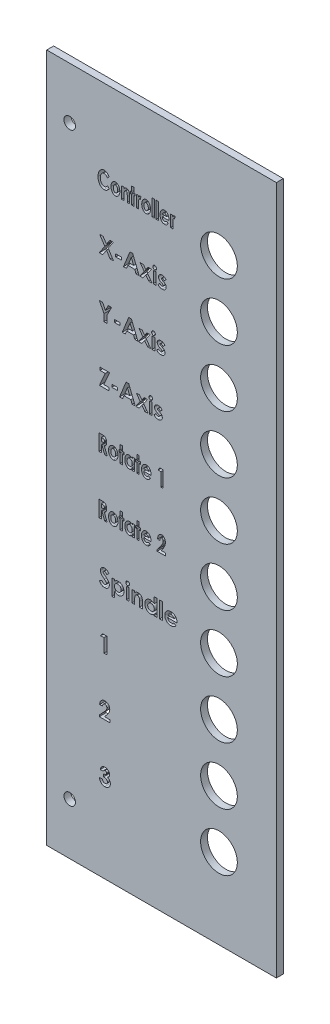
from build123d import *

# Parameters (mm, degrees)
SKETCH1_W           = 100
SKETCH1_H           = 300
BOSS_EXTRUDE1_DEPTH = 3
SKETCH2_R           = 8
SKETCH2_W           = 0.987179487
SKETCH2_H           = 7.179487179
SKETCH2_W_2         = 2.423076923
SKETCH2_H_2         = 1.166666667
SKETCH2_W_3         = 1.256410256
SKETCH2_H_3         = 5.115384615
SKETCH2_W_4         = 1.256410257
CUT_EXTRUDE1_DEPTH  = 159.142340946
SKETCH3_R           = 2.5
CUT_EXTRUDE4_DEPTH  = 3


with BuildPart() as part:
    # Sketch1 → Boss-Extrude1 (new body)
    with BuildSketch(Plane.XY):
        Rectangle(SKETCH1_W, SKETCH1_H)
    extrude(amount=BOSS_EXTRUDE1_DEPTH)

    # Sketch2 → Cut-Extrude1 (cut, through all)
    # profile 1 of 66: a face of its own
    with BuildSketch(Plane.XY.offset(3)):
        with Locations((25, 110)):
            Circle(SKETCH2_R)
    # profile 2 of 66: a face of its own
    with BuildSketch(Plane.XY.offset(3)):
        with Locations((25, 85)):
            Circle(SKETCH2_R)
    # profile 3 of 66: a face of its own
    with BuildSketch(Plane.XY.offset(3)):
        with Locations((25, 60)):
            Circle(SKETCH2_R)
    # profile 4 of 66: a face of its own
    with BuildSketch(Plane.XY.offset(3)):
        with Locations((25, 35)):
            Circle(SKETCH2_R)
    # profile 5 of 66: a face of its own
    with BuildSketch(Plane.XY.offset(3)):
        with Locations((25, 10)):
            Circle(SKETCH2_R)
    # profile 6 of 66: a face of its own
    with BuildSketch(Plane.XY.offset(3)):
        with Locations((25, -15)):
            Circle(SKETCH2_R)
    # profile 7 of 66: a face of its own
    with BuildSketch(Plane.XY.offset(3)):
        with Locations((25, -40)):
            Circle(SKETCH2_R)
    # profile 8 of 66: a face of its own
    with BuildSketch(Plane.XY.offset(3)):
        with Locations((25, -65)):
            Circle(SKETCH2_R)
    # profile 9 of 66: a face of its own
    with BuildSketch(Plane.XY.offset(3)):
        with Locations((25, -90)):
            Circle(SKETCH2_R)
    # profile 10 of 66: a face of its own
    with BuildSketch(Plane.XY.offset(3)):
        with Locations((25, -115)):
            Circle(SKETCH2_R)
    # profile 11 of 66: a face of its own
    with BuildSketch(Plane.XY.offset(3)):
        with BuildLine():
            Line((-22.820512821, 115.785657051), (-23.480969551, 114.905048077))
            add(Edge.make_bspline(
                [(-23.480969551, 114.905048077), (-23.536789887, 114.985382126), (-23.644289715, 115.140090912), (-23.81908817, 115.349720068), (-24.003210606, 115.524001532), (-24.188966925, 115.671336708), (-24.383254904, 115.782842122), (-24.581730453, 115.864764099), (-24.786830876, 115.914396816), (-24.92595387, 115.920186959), (-24.995392628, 115.923076923)],
                knots=[0, 0, 0, 0, 1.233135283, 2.374794541, 3.433543167, 4.424901994, 5.356888989, 6.24770211, 7.125396995, 8, 8, 8, 8], degree=3))
            add(Edge.make_bspline(
                [(-24.995392628, 115.923076923), (-25.053500762, 115.920867901), (-25.168288157, 115.916504176), (-25.337260192, 115.883204182), (-25.498914414, 115.828374183), (-25.6537577, 115.751746539), (-25.800093615, 115.652305573), (-25.939955997, 115.531602754), (-26.073012052, 115.389731153), (-26.196493003, 115.227517455), (-26.30936749, 115.050146268), (-26.409489511, 114.86113968), (-26.491652933, 114.660565878), (-26.560853701, 114.451300313), (-26.614306485, 114.231361572), (-26.651055404, 114.001091009), (-26.676448859, 113.760915262), (-26.678462461, 113.597290697), (-26.679487179, 113.514022436)],
                knots=[0, 0, 0, 0, 0.857055299, 1.693035698, 2.530608008, 3.369627468, 4.234309046, 5.134306977, 6.090685172, 7.099144936, 8.138113589, 9.190187033, 10.250794929, 11.332653285, 12.440109725, 13.586510154, 14.771779139, 16, 16, 16, 16], degree=3))
            add(Edge.make_bspline(
                [(-26.679487179, 113.514022436), (-26.676656889, 113.398936435), (-26.67114023, 113.174616646), (-26.632320601, 112.848111161), (-26.564522048, 112.541608818), (-26.472184245, 112.256187282), (-26.352711626, 111.995674465), (-26.21149229, 111.762837617), (-26.046975348, 111.558822715), (-25.861206187, 111.387205215), (-25.659312742, 111.247036654), (-25.441642846, 111.150364564), (-25.213885545, 111.08767942), (-25.057499099, 111.08053108), (-24.978565705, 111.076923077)],
                knots=[0, 0, 0, 0, 1.254421211, 2.445054134, 3.577408748, 4.671424979, 5.70874323, 6.694424396, 7.632594579, 8.555603306, 9.443081192, 10.298232915, 11.141062055, 12, 12, 12, 12], degree=3))
            add(Edge.make_bspline(
                [(-24.978565705, 111.076923077), (-24.911519983, 111.07966311), (-24.778978299, 111.085079841), (-24.584618335, 111.127037639), (-24.399550243, 111.196202165), (-24.253158198, 111.277201247), (-24.138016377, 111.356300287), (-24.050617061, 111.429900618), (-23.960218526, 111.513095558), (-23.867913896, 111.607471464), (-23.772077343, 111.712448323), (-23.676406472, 111.830368677), (-23.57764871, 111.958417727), (-23.512952439, 112.048478158), (-23.479567308, 112.094951923)],
                knots=[0, 0, 0, 0, 1.27414937, 2.518846805, 3.762019965, 5.01903362, 5.689683096, 6.415764911, 7.189466772, 8.025404481, 8.925245412, 9.891471181, 10.911938681, 12, 12, 12, 12], degree=3))
            Line((-23.479567308, 112.094951923), (-22.840144231, 111.156850962))
            add(Edge.make_bspline(
                [(-22.840144231, 111.156850962), (-22.885523919, 111.096225105), (-22.973908514, 110.978146027), (-23.109657587, 110.811696643), (-23.243683278, 110.659455008), (-23.374542592, 110.520393602), (-23.504837516, 110.396936312), (-23.633482813, 110.288368242), (-23.758814622, 110.192179502), (-23.925323774, 110.086142319), (-24.141050141, 109.977634575), (-24.416951026, 109.886824011), (-24.709843301, 109.830365052), (-24.910998949, 109.823841114), (-25.013621795, 109.820512821)],
                knots=[0, 0, 0, 0, 1.022816796, 1.992108183, 2.900230424, 3.762141705, 4.570499782, 5.323112584, 6.03528704, 6.702556347, 7.987254078, 9.284994759, 10.61489565, 12, 12, 12, 12], degree=3))
            add(Edge.make_bspline(
                [(-25.013621795, 109.820512821), (-25.108702595, 109.823879645), (-25.295872956, 109.830507374), (-25.570317588, 109.879035335), (-25.831108195, 109.960269596), (-26.077969603, 110.076012449), (-26.311972869, 110.222365734), (-26.531881501, 110.402771447), (-26.738742227, 110.614353371), (-26.92932979, 110.856670403), (-27.102092644, 111.12348726), (-27.254559877, 111.410735987), (-27.381651757, 111.717122205), (-27.485454865, 112.041382104), (-27.56655652, 112.383186773), (-27.625166619, 112.743005181), (-27.660869175, 113.121135298), (-27.664706483, 113.379327495), (-27.666666667, 113.511217949)],
                knots=[0, 0, 0, 0, 0.900851096, 1.773361443, 2.632236294, 3.48247648, 4.350250648, 5.241376972, 6.171762843, 7.149349044, 8.15814468, 9.180687747, 10.227180094, 11.297507552, 12.404225695, 13.553455901, 14.750249567, 16, 16, 16, 16], degree=3))
            add(Edge.make_bspline(
                [(-27.666666667, 113.511217949), (-27.665460172, 113.597240388), (-27.663071489, 113.767552287), (-27.648018622, 114.018895435), (-27.620681202, 114.263000983), (-27.585136533, 114.499538046), (-27.536970734, 114.72927981), (-27.478654833, 114.951205401), (-27.409013845, 115.165749959), (-27.331469027, 115.373266973), (-27.241690183, 115.571464311), (-27.143086033, 115.760704747), (-27.035629382, 115.939770604), (-26.918653478, 116.10858349), (-26.793734633, 116.267851237), (-26.65880107, 116.416883586), (-26.514041405, 116.555494887), (-26.361935815, 116.684618616), (-26.203144308, 116.799777685), (-26.041201133, 116.902195839), (-25.875393362, 116.987521156), (-25.706955041, 117.058642754), (-25.534259471, 117.111497042), (-25.359619194, 117.151469233), (-25.181072342, 117.173991532), (-25.061356644, 117.177645181), (-25.001001603, 117.179487179)],
                knots=[0, 0, 0, 0, 1.232281824, 2.439738531, 3.60504259, 4.749912197, 5.864785202, 6.965901308, 8.035208004, 9.094722212, 10.137603849, 11.149858396, 12.150016377, 13.126954941, 14.090051581, 15.047592881, 16.004150477, 16.959183677, 17.90335851, 18.811816233, 19.70122305, 20.571651294, 21.427222418, 22.284913076, 23.135333593, 24, 24, 24, 24], degree=3))
            add(Edge.make_bspline(
                [(-25.001001603, 117.179487179), (-24.949537512, 117.178424144), (-24.846802961, 117.176302072), (-24.693584381, 117.158655909), (-24.541466582, 117.131234246), (-24.391946122, 117.089666956), (-24.242982917, 117.039399175), (-24.096840622, 116.97586043), (-23.950801799, 116.902617897), (-23.807719327, 116.817397746), (-23.667124254, 116.722003718), (-23.531535203, 116.616323986), (-23.398609316, 116.503131064), (-23.273246572, 116.377885481), (-23.152020511, 116.244041406), (-23.035576994, 116.10108497), (-22.9245162, 115.947751382), (-22.855522389, 115.840221168), (-22.820512821, 115.785657051)],
                knots=[0, 0, 0, 0, 0.913513431, 1.82358982, 2.735140814, 3.655190425, 4.57639966, 5.524470001, 6.482046041, 7.475524374, 8.479142263, 9.49673167, 10.52653279, 11.576994229, 12.640488379, 13.731854518, 14.849073659, 16, 16, 16, 16], degree=3))
        make_face()
    # profile 12 of 66: a face of its own
    with BuildSketch(Plane.XY.offset(3)):
        with BuildLine():
            add(Edge.make_bspline(
                [(-20.105769231, 115.205128205), (-20.062714951, 115.204046981), (-19.976746241, 115.201888046), (-19.848608909, 115.184487617), (-19.722662511, 115.156112713), (-19.598229406, 115.118867161), (-19.477133334, 115.067392142), (-19.358121665, 115.005157885), (-19.239360059, 114.934195152), (-19.086519757, 114.820338585), (-18.903092267, 114.659755082), (-18.711791931, 114.430051102), (-18.543442217, 114.170697507), (-18.406350606, 113.880447743), (-18.291728333, 113.57130858), (-18.213311911, 113.245022441), (-18.161626861, 112.907572533), (-18.156459745, 112.678013053), (-18.153846154, 112.561899038)],
                knots=[0, 0, 0, 0, 0.569037576, 1.136226803, 1.705935018, 2.274737683, 2.85084432, 3.44228945, 4.049534712, 4.677400786, 5.959806408, 7.262126169, 8.616194343, 10.036760311, 11.497037048, 12.967281661, 14.466013685, 16, 16, 16, 16], degree=3))
            add(Edge.make_bspline(
                [(-18.153846154, 112.561899038), (-18.157269159, 112.444896632), (-18.164034327, 112.213655079), (-18.212132995, 111.872758385), (-18.294462236, 111.543747787), (-18.38829249, 111.280114719), (-18.479018181, 111.079046276), (-18.550746865, 110.935756787), (-18.631956579, 110.80229024), (-18.716512141, 110.676036703), (-18.808226759, 110.559142623), (-18.905657925, 110.450962799), (-19.00734479, 110.349217846), (-19.11685956, 110.258587116), (-19.230274797, 110.177856565), (-19.345514561, 110.104920968), (-19.46465469, 110.045258081), (-19.586288287, 109.995203276), (-19.711246557, 109.957365169), (-19.839007722, 109.931376026), (-19.969238636, 109.91324084), (-20.057095246, 109.911259324), (-20.1015625, 109.91025641)],
                knots=[0, 0, 0, 0, 1.927412715, 3.809305506, 5.658343924, 7.507125749, 8.410221296, 9.291885473, 10.145040667, 10.98230403, 11.794143525, 12.590346565, 13.379930515, 14.161816176, 14.929001413, 15.672635689, 16.406193535, 17.121206311, 17.837420685, 18.553303785, 19.267777257, 20, 20, 20, 20], degree=3))
            add(Edge.make_bspline(
                [(-20.1015625, 109.91025641), (-20.166681998, 109.912850795), (-20.29506881, 109.917965772), (-20.483993159, 109.953642254), (-20.664828839, 110.014741363), (-20.838544086, 110.099829683), (-21.00554241, 110.208763625), (-21.163498895, 110.343548757), (-21.316465427, 110.499769556), (-21.456867862, 110.680442462), (-21.588418234, 110.875860902), (-21.701939581, 111.085495661), (-21.797401082, 111.30529227), (-21.876203573, 111.535020946), (-21.938143395, 111.774999858), (-21.980712161, 112.02551021), (-22.008651974, 112.285957479), (-22.011413709, 112.463199811), (-22.012820513, 112.553485577)],
                knots=[0, 0, 0, 0, 0.866421474, 1.708199457, 2.548113849, 3.399375859, 4.275809479, 5.19408801, 6.157419637, 7.180357962, 8.234442618, 9.289352835, 10.347887868, 11.419951925, 12.518257325, 13.642122707, 14.798916969, 16, 16, 16, 16], degree=3))
            add(Edge.make_bspline(
                [(-22.012820513, 112.553485577), (-22.011025807, 112.649854348), (-22.007506078, 112.838850277), (-21.977213159, 113.115870743), (-21.929012182, 113.381142197), (-21.858023179, 113.633522831), (-21.770629873, 113.875123684), (-21.659814684, 114.102271594), (-21.532892827, 114.319637362), (-21.431387766, 114.45263526), (-21.380408654, 114.51943109)],
                knots=[0, 0, 0, 0, 1.097875748, 2.153125383, 3.171697827, 4.166755135, 5.137421136, 6.095110797, 7.043303263, 8, 8, 8, 8], degree=3))
            add(Edge.make_bspline(
                [(-21.380408654, 114.51943109), (-21.334192759, 114.574095454), (-21.244620283, 114.680042174), (-21.097382989, 114.819842443), (-20.945481621, 114.938625439), (-20.787971597, 115.036626797), (-20.624161328, 115.111181006), (-20.455755336, 115.165060366), (-20.282361059, 115.198427525), (-20.16480803, 115.20288801), (-20.105769231, 115.205128205)],
                knots=[0, 0, 0, 0, 1.145570458, 2.22026606, 3.244326662, 4.228923729, 5.183476121, 6.118461075, 7.055032451, 8, 8, 8, 8], degree=3))
        make_face()
        with BuildLine():
            add(Edge.make_bspline(
                [(-20.084735577, 114.038461538), (-20.117498992, 114.036815334), (-20.182583776, 114.033545135), (-20.278796032, 114.016482535), (-20.369116872, 113.980471112), (-20.457311605, 113.936914432), (-20.53820893, 113.875611803), (-20.618727318, 113.806233208), (-20.689905247, 113.718796497), (-20.760380247, 113.623389874), (-20.823051992, 113.516634245), (-20.87763011, 113.402205547), (-20.922411139, 113.279852606), (-20.960393485, 113.151149369), (-20.989657718, 113.014725241), (-21.010576823, 112.870923306), (-21.023298334, 112.720115824), (-21.024851518, 112.617078844), (-21.025641026, 112.564703526)],
                knots=[0, 0, 0, 0, 0.81418791, 1.61739077, 2.410390334, 3.219852988, 4.050651174, 4.92162885, 5.851575636, 6.840173687, 7.864873532, 8.91833065, 9.982908871, 11.095281161, 12.246716745, 13.442817419, 14.700143842, 16, 16, 16, 16], degree=3))
            add(Edge.make_bspline(
                [(-21.025641026, 112.564703526), (-21.024858791, 112.510461397), (-21.023332551, 112.404628142), (-21.01073077, 112.250045796), (-20.989099191, 112.103698119), (-20.962511777, 111.964455505), (-20.923298591, 111.833849843), (-20.879785658, 111.709627618), (-20.824245307, 111.594885653), (-20.763009827, 111.488063216), (-20.695332913, 111.391852849), (-20.621260446, 111.308512731), (-20.544780036, 111.235541868), (-20.461240401, 111.178453135), (-20.37456773, 111.132215584), (-20.282979642, 111.099697709), (-20.186406873, 111.081554799), (-20.120798513, 111.078481172), (-20.087540064, 111.076923077)],
                knots=[0, 0, 0, 0, 1.335748411, 2.606214153, 3.815769351, 4.978402928, 6.09315067, 7.171034006, 8.216275922, 9.227168476, 10.201347212, 11.10664475, 11.970063253, 12.797110818, 13.590049483, 14.38373979, 15.180679012, 16, 16, 16, 16], degree=3))
            add(Edge.make_bspline(
                [(-20.087540064, 111.076923077), (-20.054255835, 111.078332784), (-19.988505559, 111.081117544), (-19.892218612, 111.101448313), (-19.800334329, 111.134018948), (-19.7123055, 111.178757752), (-19.630691036, 111.239587265), (-19.551768994, 111.310632567), (-19.478567805, 111.39669545), (-19.409250019, 111.49357723), (-19.346575717, 111.601193569), (-19.291880647, 111.717281373), (-19.24379065, 111.840166383), (-19.20646807, 111.971331648), (-19.176957689, 112.109061482), (-19.156109338, 112.254288165), (-19.143324764, 112.40695338), (-19.141802618, 112.511392665), (-19.141025641, 112.564703526)],
                knots=[0, 0, 0, 0, 0.818709998, 1.617294763, 2.410393193, 3.212944463, 4.036649098, 4.907893351, 5.821176835, 6.810671282, 7.836536475, 8.880998926, 9.966155747, 11.080072193, 12.232921312, 13.430190806, 14.688245147, 16, 16, 16, 16], degree=3))
            add(Edge.make_bspline(
                [(-19.141025641, 112.564703526), (-19.141815749, 112.618011224), (-19.143363621, 112.722444314), (-19.155964273, 112.875153819), (-19.177383902, 113.019675655), (-19.204361927, 113.156980617), (-19.243366696, 113.285745441), (-19.286807234, 113.408642201), (-19.342894269, 113.522102302), (-19.403032852, 113.628730076), (-19.472468716, 113.723502708), (-19.544297476, 113.808971189), (-19.623738626, 113.878643572), (-19.705935936, 113.9383813), (-19.79443, 113.982323965), (-19.886830763, 114.016055224), (-19.984508883, 114.033754597), (-20.051021577, 114.036878229), (-20.084735577, 114.038461538)],
                knots=[0, 0, 0, 0, 1.31823623, 2.582506614, 3.785691813, 4.930546674, 6.038870566, 7.110415707, 8.149611759, 9.164741556, 10.13360201, 11.051398025, 11.919205841, 12.740254036, 13.557059903, 14.35407703, 15.165713446, 16, 16, 16, 16], degree=3))
        make_face(mode=Mode.SUBTRACT)
    # profile 13 of 66: a face of its own
    with BuildSketch(Plane.XY.offset(3)):
        with BuildLine():
            Line((-17.346153846, 115.115384615), (-16.358974359, 115.115384615))
            Line((-16.358974359, 115.115384615), (-16.358974359, 114.57411859))
            add(Edge.make_bspline(
                [(-16.358974359, 114.57411859), (-16.30699024, 114.629645365), (-16.208612809, 114.7347271), (-16.056504142, 114.870863788), (-15.91357635, 114.982144604), (-15.775402482, 115.067213274), (-15.639591468, 115.128203956), (-15.504858503, 115.172510567), (-15.368286098, 115.200573349), (-15.276104645, 115.203613313), (-15.230168269, 115.205128205)],
                knots=[0, 0, 0, 0, 1.368321554, 2.589482328, 3.669656159, 4.624728175, 5.501939695, 6.342570775, 7.174060609, 8, 8, 8, 8], degree=3))
            add(Edge.make_bspline(
                [(-15.230168269, 115.205128205), (-15.183806169, 115.203405561), (-15.09233126, 115.200006691), (-14.95715963, 115.176044704), (-14.828102742, 115.133038214), (-14.70352019, 115.075969264), (-14.586496442, 114.99970755), (-14.473095302, 114.90934709), (-14.365310109, 114.801641205), (-14.301052028, 114.719726457), (-14.268229167, 114.677884615)],
                knots=[0, 0, 0, 0, 0.97587902, 1.925461651, 2.877589676, 3.832813895, 4.801773642, 5.809810835, 6.881257035, 8, 8, 8, 8], degree=3))
            add(Edge.make_bspline(
                [(-14.268229167, 114.677884615), (-14.241115938, 114.638730911), (-14.185888686, 114.558978274), (-14.119127067, 114.425722954), (-14.063401774, 114.27974459), (-14.015259951, 114.121142501), (-13.979250711, 113.947965179), (-13.954886215, 113.761379952), (-13.939152375, 113.56196559), (-13.937003473, 113.424777308), (-13.935897436, 113.354166667)],
                knots=[0, 0, 0, 0, 0.823167098, 1.676718662, 2.570285851, 3.524585509, 4.541265829, 5.626641772, 6.778435402, 8, 8, 8, 8], degree=3))
            Line((-13.935897436, 113.354166667), (-13.935897436, 110))
            Line((-13.935897436, 110), (-14.923076923, 110))
            Line((-14.923076923, 110), (-14.923076923, 112.221153846))
            add(Edge.make_bspline(
                [(-14.923076923, 112.221153846), (-14.923415684, 112.293604501), (-14.924064817, 112.432434506), (-14.927021863, 112.631087801), (-14.930540794, 112.810624715), (-14.93785443, 112.970947759), (-14.946159376, 113.112123073), (-14.955156292, 113.234290694), (-14.967929814, 113.337144006), (-14.985670751, 113.446738053), (-15.014754084, 113.563990378), (-15.060283333, 113.687570664), (-15.116553114, 113.794351678), (-15.185657951, 113.882073033), (-15.264511609, 113.951690297), (-15.352715371, 114.003058414), (-15.450759188, 114.03296642), (-15.519300039, 114.036611535), (-15.554086538, 114.038461538)],
                knots=[0, 0, 0, 0, 1.638726682, 3.140129425, 4.493743957, 5.700134594, 6.769810319, 7.692565034, 8.470179661, 9.113262101, 10.203020583, 11.19663962, 12.085962981, 12.921435194, 13.708124144, 14.451644469, 15.214163983, 16, 16, 16, 16], degree=3))
            add(Edge.make_bspline(
                [(-15.554086538, 114.038461538), (-15.599828041, 114.035074719), (-15.690594386, 114.028354144), (-15.821152454, 113.978309641), (-15.938206843, 113.892849396), (-16.044557747, 113.778494189), (-16.135866597, 113.635062094), (-16.215149458, 113.468226444), (-16.276049487, 113.275416902), (-16.303768829, 113.137598529), (-16.318309295, 113.065304487)],
                knots=[0, 0, 0, 0, 0.816729415, 1.620662647, 2.459950321, 3.388089468, 4.396283796, 5.487718658, 6.682157034, 8, 8, 8, 8], degree=3))
            add(Edge.make_bspline(
                [(-16.318309295, 113.065304487), (-16.321788518, 113.042427291), (-16.32957618, 112.9912205), (-16.337332964, 112.905543085), (-16.344282545, 112.803155694), (-16.349702123, 112.683464268), (-16.353916106, 112.546030122), (-16.356031697, 112.391291322), (-16.359833971, 112.219299199), (-16.359270386, 112.099161185), (-16.358974359, 112.036057692)],
                knots=[0, 0, 0, 0, 0.538647432, 1.205672489, 2.001943187, 2.927964164, 3.99493125, 5.203064995, 6.530886601, 8, 8, 8, 8], degree=3))
            Line((-16.358974359, 112.036057692), (-16.358974359, 110))
            Line((-16.358974359, 110), (-17.346153846, 110))
            Line((-17.346153846, 110), (-17.346153846, 115.115384615))
        make_face()
    # profile 14 of 66: a face of its own
    with BuildSketch(Plane.XY.offset(3)):
        Polygon((-13.038461538, 117.179487179), (-12.051282051, 117.179487179), (-12.051282051, 115.115384615), (-11.512820513, 115.115384615), (-11.512820513, 114.038461538), (-12.051282051, 114.038461538), (-12.051282051, 110), (-13.038461538, 110), (-13.038461538, 114.038461538), (-13.487179487, 114.038461538), (-13.487179487, 115.115384615), (-13.038461538, 115.115384615), align=None)
    # profile 15 of 66: a face of its own
    with BuildSketch(Plane.XY.offset(3)):
        with BuildLine():
            Line((-10.974358974, 115.115384615), (-10.076923077, 115.115384615))
            Line((-10.076923077, 115.115384615), (-10.076923077, 114.485777244))
            add(Edge.make_bspline(
                [(-10.076923077, 114.485777244), (-10.057005577, 114.541385728), (-10.018749888, 114.648193355), (-9.946325806, 114.793858217), (-9.864197938, 114.918967014), (-9.771960682, 115.021602353), (-9.671919656, 115.10258889), (-9.566458913, 115.161602182), (-9.455850685, 115.198848558), (-9.379812798, 115.203048008), (-9.342147436, 115.205128205)],
                knots=[0, 0, 0, 0, 1.289498679, 2.476749608, 3.544387174, 4.549243533, 5.478919144, 6.342732035, 7.17907242, 8, 8, 8, 8], degree=3))
            add(Edge.make_bspline(
                [(-9.342147436, 115.205128205), (-9.314466899, 115.203138783), (-9.257351221, 115.199033834), (-9.170753078, 115.176506248), (-9.084688854, 115.133678857), (-9.029086976, 115.097731434), (-9, 115.078926282)],
                knots=[0, 0, 0, 0, 0.898533413, 1.854022746, 2.877376266, 4, 4, 4, 4], degree=3))
            Line((-9, 115.078926282), (-9.267828526, 114.014623397))
            add(Edge.make_bspline(
                [(-9.267828526, 114.014623397), (-9.291933802, 114.031281183), (-9.336359317, 114.06198113), (-9.40114375, 114.100546186), (-9.46132422, 114.122840038), (-9.500003066, 114.126538825), (-9.517427885, 114.128205128)],
                knots=[0, 0, 0, 0, 1.263753498, 2.329071002, 3.24724657, 4, 4, 4, 4], degree=3))
            add(Edge.make_bspline(
                [(-9.517427885, 114.128205128), (-9.533931722, 114.127140191), (-9.566886116, 114.125013753), (-9.615106331, 114.106867214), (-9.659622593, 114.07667509), (-9.702851002, 114.035746458), (-9.744492932, 113.983996454), (-9.783757851, 113.91961091), (-9.820898448, 113.844406466), (-9.85702184, 113.756656409), (-9.889712041, 113.652263396), (-9.916754083, 113.526908228), (-9.940692529, 113.379527331), (-9.957424523, 113.209911884), (-9.973275212, 113.018766715), (-9.984462598, 112.805541307), (-9.989125006, 112.570332913), (-9.990611363, 112.406250976), (-9.991386218, 112.320713141)],
                knots=[0, 0, 0, 0, 0.399148388, 0.797008158, 1.230686068, 1.695650286, 2.235366837, 2.835882526, 3.519947345, 4.266900472, 5.134108266, 6.16766959, 7.372862522, 8.751741079, 10.297719182, 12.022336572, 13.926397473, 16, 16, 16, 16], degree=3))
            Line((-9.991386218, 112.320713141), (-9.987179487, 112.071113782))
            Line((-9.987179487, 112.071113782), (-9.987179487, 110))
            Line((-9.987179487, 110), (-10.974358974, 110))
            Line((-10.974358974, 110), (-10.974358974, 115.115384615))
        make_face()
    # profile 16 of 66: a face of its own
    with BuildSketch(Plane.XY.offset(3)):
        with BuildLine():
            add(Edge.make_bspline(
                [(-6.733974359, 115.205128205), (-6.690920079, 115.204046981), (-6.604951369, 115.201888046), (-6.476814038, 115.184487617), (-6.350867639, 115.156112713), (-6.226434535, 115.118867161), (-6.105338462, 115.067392142), (-5.986326793, 115.005157885), (-5.867565187, 114.934195152), (-5.714724886, 114.820338585), (-5.531297395, 114.659755082), (-5.339997059, 114.430051102), (-5.171647345, 114.170697507), (-5.034555734, 113.880447743), (-4.919933461, 113.57130858), (-4.841517039, 113.245022441), (-4.78983199, 112.907572533), (-4.784664873, 112.678013053), (-4.782051282, 112.561899038)],
                knots=[0, 0, 0, 0, 0.569037576, 1.136226803, 1.705935018, 2.274737683, 2.85084432, 3.44228945, 4.049534712, 4.677400786, 5.959806408, 7.262126169, 8.616194343, 10.036760311, 11.497037048, 12.967281661, 14.466013685, 16, 16, 16, 16], degree=3))
            add(Edge.make_bspline(
                [(-4.782051282, 112.561899038), (-4.785474287, 112.444896632), (-4.792239455, 112.213655079), (-4.840338124, 111.872758385), (-4.922667364, 111.543747787), (-5.016497618, 111.280114719), (-5.107223309, 111.079046276), (-5.178951993, 110.935756787), (-5.260161707, 110.80229024), (-5.344717269, 110.676036703), (-5.436431887, 110.559142623), (-5.533863053, 110.450962799), (-5.635549918, 110.349217846), (-5.745064688, 110.258587116), (-5.858479925, 110.177856565), (-5.973719689, 110.104920968), (-6.092859818, 110.045258081), (-6.214493415, 109.995203276), (-6.339451685, 109.957365169), (-6.467212851, 109.931376026), (-6.597443764, 109.91324084), (-6.685300374, 109.911259324), (-6.729767628, 109.91025641)],
                knots=[0, 0, 0, 0, 1.927412715, 3.809305506, 5.658343924, 7.507125749, 8.410221296, 9.291885473, 10.145040667, 10.98230403, 11.794143525, 12.590346565, 13.379930515, 14.161816176, 14.929001413, 15.672635689, 16.406193535, 17.121206311, 17.837420685, 18.553303785, 19.267777257, 20, 20, 20, 20], degree=3))
            add(Edge.make_bspline(
                [(-6.729767628, 109.91025641), (-6.794887126, 109.912850795), (-6.923273938, 109.917965772), (-7.112198287, 109.953642254), (-7.293033967, 110.014741363), (-7.466749214, 110.099829683), (-7.633747538, 110.208763625), (-7.791704023, 110.343548757), (-7.944670556, 110.499769556), (-8.085072991, 110.680442462), (-8.216623362, 110.875860902), (-8.33014471, 111.085495661), (-8.425606211, 111.30529227), (-8.504408702, 111.535020946), (-8.566348523, 111.774999858), (-8.60891729, 112.02551021), (-8.636857103, 112.285957479), (-8.639618837, 112.463199811), (-8.641025641, 112.553485577)],
                knots=[0, 0, 0, 0, 0.866421474, 1.708199457, 2.548113849, 3.399375859, 4.275809479, 5.19408801, 6.157419637, 7.180357962, 8.234442618, 9.289352835, 10.347887868, 11.419951925, 12.518257325, 13.642122707, 14.798916969, 16, 16, 16, 16], degree=3))
            add(Edge.make_bspline(
                [(-8.641025641, 112.553485577), (-8.639230936, 112.649854348), (-8.635711206, 112.838850277), (-8.605418288, 113.115870743), (-8.557217311, 113.381142197), (-8.486228308, 113.633522831), (-8.398835001, 113.875123684), (-8.288019813, 114.102271594), (-8.161097955, 114.319637362), (-8.059592894, 114.45263526), (-8.008613782, 114.51943109)],
                knots=[0, 0, 0, 0, 1.097875748, 2.153125383, 3.171697827, 4.166755135, 5.137421136, 6.095110797, 7.043303263, 8, 8, 8, 8], degree=3))
            add(Edge.make_bspline(
                [(-8.008613782, 114.51943109), (-7.962397887, 114.574095454), (-7.872825411, 114.680042174), (-7.725588117, 114.819842443), (-7.573686749, 114.938625439), (-7.416176726, 115.036626797), (-7.252366456, 115.111181006), (-7.083960464, 115.165060366), (-6.910566187, 115.198427525), (-6.793013158, 115.20288801), (-6.733974359, 115.205128205)],
                knots=[0, 0, 0, 0, 1.145570458, 2.22026606, 3.244326662, 4.228923729, 5.183476121, 6.118461075, 7.055032451, 8, 8, 8, 8], degree=3))
        make_face()
        with BuildLine():
            add(Edge.make_bspline(
                [(-6.712940705, 114.038461538), (-6.74570412, 114.036815334), (-6.810788904, 114.033545135), (-6.907001161, 114.016482535), (-6.997322001, 113.980471112), (-7.085516734, 113.936914432), (-7.166414058, 113.875611803), (-7.246932446, 113.806233208), (-7.318110375, 113.718796497), (-7.388585376, 113.623389874), (-7.45125712, 113.516634245), (-7.505835238, 113.402205547), (-7.550616267, 113.279852606), (-7.588598613, 113.151149369), (-7.617862847, 113.014725241), (-7.638781951, 112.870923306), (-7.651503462, 112.720115824), (-7.653056646, 112.617078844), (-7.653846154, 112.564703526)],
                knots=[0, 0, 0, 0, 0.81418791, 1.61739077, 2.410390334, 3.219852988, 4.050651174, 4.92162885, 5.851575636, 6.840173687, 7.864873532, 8.91833065, 9.982908871, 11.095281161, 12.246716745, 13.442817419, 14.700143842, 16, 16, 16, 16], degree=3))
            add(Edge.make_bspline(
                [(-7.653846154, 112.564703526), (-7.653063919, 112.510461397), (-7.651537679, 112.404628142), (-7.638935898, 112.250045796), (-7.61730432, 112.103698119), (-7.590716905, 111.964455505), (-7.551503719, 111.833849843), (-7.507990786, 111.709627618), (-7.452450435, 111.594885653), (-7.391214955, 111.488063216), (-7.323538041, 111.391852849), (-7.249465575, 111.308512731), (-7.172985164, 111.235541868), (-7.089445529, 111.178453135), (-7.002772858, 111.132215584), (-6.91118477, 111.099697709), (-6.814612002, 111.081554799), (-6.749003641, 111.078481172), (-6.715745192, 111.076923077)],
                knots=[0, 0, 0, 0, 1.335748411, 2.606214153, 3.815769351, 4.978402928, 6.09315067, 7.171034006, 8.216275922, 9.227168476, 10.201347212, 11.10664475, 11.970063253, 12.797110818, 13.590049483, 14.38373979, 15.180679012, 16, 16, 16, 16], degree=3))
            add(Edge.make_bspline(
                [(-6.715745192, 111.076923077), (-6.682460964, 111.078332784), (-6.616710687, 111.081117544), (-6.52042374, 111.101448313), (-6.428539458, 111.134018948), (-6.340510628, 111.178757752), (-6.258896164, 111.239587265), (-6.179974122, 111.310632567), (-6.106772933, 111.39669545), (-6.037455147, 111.49357723), (-5.974780845, 111.601193569), (-5.920085775, 111.717281373), (-5.871995778, 111.840166383), (-5.834673199, 111.971331648), (-5.805162817, 112.109061482), (-5.784314467, 112.254288165), (-5.771529892, 112.40695338), (-5.770007746, 112.511392665), (-5.769230769, 112.564703526)],
                knots=[0, 0, 0, 0, 0.818709998, 1.617294763, 2.410393193, 3.212944463, 4.036649098, 4.907893351, 5.821176835, 6.810671282, 7.836536475, 8.880998926, 9.966155747, 11.080072193, 12.232921312, 13.430190806, 14.688245147, 16, 16, 16, 16], degree=3))
            add(Edge.make_bspline(
                [(-5.769230769, 112.564703526), (-5.770020878, 112.618011224), (-5.771568749, 112.722444314), (-5.784169401, 112.875153819), (-5.805589031, 113.019675655), (-5.832567056, 113.156980617), (-5.871571825, 113.285745441), (-5.915012362, 113.408642201), (-5.971099397, 113.522102302), (-6.03123798, 113.628730076), (-6.100673845, 113.723502708), (-6.172502604, 113.808971189), (-6.251943754, 113.878643572), (-6.334141064, 113.9383813), (-6.422635128, 113.982323965), (-6.515035891, 114.016055224), (-6.612714011, 114.033754597), (-6.679226706, 114.036878229), (-6.712940705, 114.038461538)],
                knots=[0, 0, 0, 0, 1.31823623, 2.582506614, 3.785691813, 4.930546674, 6.038870566, 7.110415707, 8.149611759, 9.164741556, 10.13360201, 11.051398025, 11.919205841, 12.740254036, 13.557059903, 14.35407703, 15.165713446, 16, 16, 16, 16], degree=3))
        make_face(mode=Mode.SUBTRACT)
    # profile 17 of 66: a face of its own
    with BuildSketch(Plane.XY.offset(3)):
        with Locations((-3.570512821, 113.58974359)):
            Rectangle(SKETCH2_W, SKETCH2_H)
    # profile 18 of 66: a face of its own
    with BuildSketch(Plane.XY.offset(3)):
        with Locations((-1.865384616, 113.58974359)):
            Rectangle(SKETCH2_W, SKETCH2_H)
    # profile 19 of 66: a face of its own
    with BuildSketch(Plane.XY.offset(3)):
        with BuildLine():
            Line((3.202323718, 112.243589744), (0.333333333, 112.243589744))
            add(Edge.make_bspline(
                [(0.333333333, 112.243589744), (0.345417714, 112.151971385), (0.368582305, 111.976347832), (0.440188046, 111.730729547), (0.532798431, 111.512433659), (0.635454389, 111.355099634), (0.727613737, 111.246090753), (0.802191195, 111.17773214), (0.880307263, 111.118868725), (0.963707042, 111.070963526), (1.051670812, 111.033191364), (1.144343033, 111.005950336), (1.241477857, 110.990685591), (1.307841316, 110.988360415), (1.341546474, 110.987179487)],
                knots=[0, 0, 0, 0, 1.872516757, 3.589433948, 5.17344391, 6.66751844, 7.380364244, 8.064890697, 8.715465644, 9.361253571, 10.011275308, 10.65350207, 11.316130798, 12, 12, 12, 12], degree=3))
            add(Edge.make_bspline(
                [(1.341546474, 110.987179487), (1.382371593, 110.988675303), (1.462955745, 110.991627873), (1.581010574, 111.01899819), (1.695756703, 111.058391964), (1.804190354, 111.119792952), (1.910214039, 111.193560016), (2.009927108, 111.286485853), (2.10598175, 111.394831195), (2.163130207, 111.476408255), (2.192708333, 111.518629808)],
                knots=[0, 0, 0, 0, 0.934047294, 1.843703367, 2.765200096, 3.704635933, 4.688275649, 5.71929165, 6.819581803, 8, 8, 8, 8], degree=3))
            Line((2.192708333, 111.518629808), (2.935897436, 111.018028846))
            add(Edge.make_bspline(
                [(2.935897436, 111.018028846), (2.887270721, 110.929041721), (2.793512582, 110.757463872), (2.62776344, 110.526933484), (2.445676102, 110.334030029), (2.249085544, 110.176622984), (2.034115262, 110.056851474), (1.802180775, 109.970677427), (1.550390211, 109.919214789), (1.376379315, 109.91329953), (1.286858974, 109.91025641)],
                knots=[0, 0, 0, 0, 1.155069553, 2.227112603, 3.225742556, 4.17009096, 5.085984673, 6.018172798, 6.980444045, 8, 8, 8, 8], degree=3))
            add(Edge.make_bspline(
                [(1.286858974, 109.91025641), (1.216589361, 109.912189673), (1.078870623, 109.915978601), (0.877257703, 109.952473013), (0.685992676, 110.011131063), (0.504186595, 110.093717964), (0.33223206, 110.199095973), (0.171864571, 110.329948574), (0.020729684, 110.482519794), (-0.117764554, 110.657148915), (-0.243690935, 110.848563777), (-0.352984769, 111.054570031), (-0.447166859, 111.271386092), (-0.523030303, 111.500503258), (-0.581902066, 111.741077113), (-0.623381247, 111.993762233), (-0.64925535, 112.258006705), (-0.652296839, 112.437973514), (-0.653846154, 112.529647436)],
                knots=[0, 0, 0, 0, 0.927363596, 1.81750458, 2.696247256, 3.56381532, 4.447941479, 5.352333781, 6.290911321, 7.279177504, 8.291147764, 9.313068659, 10.355556673, 11.409787613, 12.496858501, 13.623443891, 14.789397784, 16, 16, 16, 16], degree=3))
            add(Edge.make_bspline(
                [(-0.653846154, 112.529647436), (-0.652295263, 112.623658404), (-0.649249412, 112.808289984), (-0.623456553, 113.078586243), (-0.582263351, 113.337097116), (-0.520825934, 113.582681898), (-0.446849818, 113.817674585), (-0.351058214, 114.038543063), (-0.242546086, 114.248907621), (-0.115340322, 114.443656611), (0.023997338, 114.621071041), (0.172098295, 114.777944252), (0.330341873, 114.909762442), (0.49728815, 115.016990567), (0.672148061, 115.10325859), (0.85733324, 115.160680622), (1.050101157, 115.199877458), (1.181956515, 115.203358347), (1.248998397, 115.205128205)],
                knots=[0, 0, 0, 0, 1.237466708, 2.430306165, 3.571485328, 4.680435297, 5.760512169, 6.810958647, 7.845915278, 8.873454086, 9.868184632, 10.812689174, 11.708549448, 12.572277795, 13.419986018, 14.266554321, 15.118629217, 16, 16, 16, 16], degree=3))
            add(Edge.make_bspline(
                [(1.248998397, 115.205128205), (1.319726505, 115.20315604), (1.458817, 115.199277674), (1.662378505, 115.163148336), (1.855355053, 115.104117588), (2.039187738, 115.022062057), (2.210950818, 114.914412032), (2.374839167, 114.786222088), (2.524186306, 114.630793505), (2.66587497, 114.45671263), (2.792121852, 114.262091394), (2.90414607, 114.052392987), (2.995782944, 113.826235959), (3.073668094, 113.586598263), (3.13141751, 113.331043232), (3.175461094, 113.061443148), (3.200456941, 112.775981608), (3.20354577, 112.580642798), (3.205128205, 112.48056891)],
                knots=[0, 0, 0, 0, 0.90530827, 1.780335716, 2.638236547, 3.485035208, 4.350672526, 5.228664823, 6.143132279, 7.10527491, 8.099949815, 9.109646547, 10.145868517, 11.221301742, 12.333744642, 13.4981397, 14.718273718, 16, 16, 16, 16], degree=3))
            Line((3.205128205, 112.48056891), (3.202323718, 112.243589744))
        make_face()
        with BuildLine():
            add(Edge.make_bspline(
                [(2.217948718, 113.230769231), (2.201881104, 113.294397212), (2.170469184, 113.418788865), (2.09596908, 113.59222665), (1.998709074, 113.746302845), (1.883579578, 113.880414256), (1.752319273, 113.990458955), (1.608246668, 114.071440097), (1.452068902, 114.119583118), (1.344209697, 114.1253093), (1.289663462, 114.128205128)],
                knots=[0, 0, 0, 0, 1.125629534, 2.20058717, 3.224913224, 4.243468738, 5.223835888, 6.150737025, 7.064796231, 8, 8, 8, 8], degree=3))
            add(Edge.make_bspline(
                [(1.289663462, 114.128205128), (1.230277804, 114.125427836), (1.11317394, 114.119951235), (0.945458412, 114.061959369), (0.786811584, 113.975078108), (0.697660534, 113.891102738), (0.651642628, 113.84775641)],
                knots=[0, 0, 0, 0, 0.991597812, 1.955353202, 2.944596113, 4, 4, 4, 4], degree=3))
            add(Edge.make_bspline(
                [(0.651642628, 113.84775641), (0.622510991, 113.813958755), (0.558557319, 113.739761614), (0.479449113, 113.599333353), (0.40280359, 113.427007756), (0.35762628, 113.299391578), (0.333333333, 113.230769231)],
                knots=[0, 0, 0, 0, 0.764229174, 1.677738256, 2.751262946, 4, 4, 4, 4], degree=3))
            Line((0.333333333, 113.230769231), (2.217948718, 113.230769231))
        make_face(mode=Mode.SUBTRACT)
    # profile 20 of 66: a face of its own
    with BuildSketch(Plane.XY.offset(3)):
        with BuildLine():
            Line((3.923076923, 115.115384615), (4.820512821, 115.115384615))
            Line((4.820512821, 115.115384615), (4.820512821, 114.485777244))
            add(Edge.make_bspline(
                [(4.820512821, 114.485777244), (4.84043032, 114.541385728), (4.878686009, 114.648193355), (4.951110091, 114.793858217), (5.033237959, 114.918967014), (5.125475216, 115.021602353), (5.225516242, 115.10258889), (5.330976984, 115.161602182), (5.441585213, 115.198848558), (5.517623099, 115.203048008), (5.555288462, 115.205128205)],
                knots=[0, 0, 0, 0, 1.289498679, 2.476749608, 3.544387174, 4.549243533, 5.478919144, 6.342732035, 7.17907242, 8, 8, 8, 8], degree=3))
            add(Edge.make_bspline(
                [(5.555288462, 115.205128205), (5.582968998, 115.203138783), (5.640084676, 115.199033834), (5.726682819, 115.176506248), (5.812747043, 115.133678857), (5.868348922, 115.097731434), (5.897435897, 115.078926282)],
                knots=[0, 0, 0, 0, 0.898533413, 1.854022746, 2.877376266, 4, 4, 4, 4], degree=3))
            Line((5.897435897, 115.078926282), (5.629607372, 114.014623397))
            add(Edge.make_bspline(
                [(5.629607372, 114.014623397), (5.605502096, 114.031281183), (5.561076581, 114.06198113), (5.496292147, 114.100546186), (5.436111678, 114.122840038), (5.397432831, 114.126538825), (5.380008013, 114.128205128)],
                knots=[0, 0, 0, 0, 1.263753498, 2.329071002, 3.24724657, 4, 4, 4, 4], degree=3))
            add(Edge.make_bspline(
                [(5.380008013, 114.128205128), (5.363504175, 114.127140191), (5.330549781, 114.125013753), (5.282329567, 114.106867214), (5.237813305, 114.07667509), (5.194584895, 114.035746458), (5.152942965, 113.983996454), (5.113678046, 113.91961091), (5.07653745, 113.844406466), (5.040414058, 113.756656409), (5.007723857, 113.652263396), (4.980681814, 113.526908228), (4.956743368, 113.379527331), (4.940011375, 113.209911884), (4.924160685, 113.018766715), (4.9129733, 112.805541307), (4.908310892, 112.570332913), (4.906824535, 112.406250976), (4.906049679, 112.320713141)],
                knots=[0, 0, 0, 0, 0.399148388, 0.797008158, 1.230686068, 1.695650286, 2.235366837, 2.835882526, 3.519947345, 4.266900472, 5.134108266, 6.16766959, 7.372862522, 8.751741079, 10.297719182, 12.022336572, 13.926397473, 16, 16, 16, 16], degree=3))
            Line((4.906049679, 112.320713141), (4.91025641, 112.071113782))
            Line((4.91025641, 112.071113782), (4.91025641, 110))
            Line((4.91025641, 110), (3.923076923, 110))
            Line((3.923076923, 110), (3.923076923, 115.115384615))
        make_face()
    # profile 21 of 66: a face of its own
    with BuildSketch(Plane.XY.offset(3)):
        Polygon((-26.927684295, 92), (-25.446915064, 92), (-23.984375, 89.752203526), (-22.519030449, 92), (-21.036858974, 92), (-23.243990385, 88.614983974), (-20.891025641, 85), (-22.371794872, 85), (-23.984375, 87.479166667), (-25.601161859, 85), (-27.083333333, 85), (-24.724759615, 88.616386218), align=None)
    # profile 22 of 66: a face of its own
    with BuildSketch(Plane.XY.offset(3)):
        with Locations((-18.737179488, 87.557692308)):
            Rectangle(SKETCH2_W_2, SKETCH2_H_2)
    # profile 23 of 66: a face of its own
    with BuildSketch(Plane.XY.offset(3)):
        Polygon((-13.755008013, 92), (-12.58974359, 92), (-9.762820513, 85), (-11.104767628, 85), (-11.648838141, 86.435897436), (-14.698717949, 86.435897436), (-15.242788462, 85), (-16.583333333, 85), align=None)
        Polygon((-13.173076923, 90.122395833), (-14.221955128, 87.692307692), (-12.124198718, 87.692307692), align=None, mode=Mode.SUBTRACT)
    # profile 24 of 66: a face of its own
    with BuildSketch(Plane.XY.offset(3)):
        Polygon((-9.281850962, 90.115384615), (-7.864182692, 90.115384615), (-6.853165064, 88.721554487), (-5.846354167, 90.115384615), (-4.428685897, 90.115384615), (-6.142227564, 87.741386218), (-4.153846154, 85), (-5.571514423, 85), (-6.848958333, 86.761217949), (-8.120793269, 85), (-9.538461538, 85), (-7.559895833, 87.741386218), align=None)
    # profile 25 of 66: a face of its own
    with BuildSketch(Plane.XY.offset(3)):
        with BuildLine():
            add(Edge.make_bspline(
                [(-2.989983974, 92.269230769), (-2.935832701, 92.266573903), (-2.829501459, 92.26135689), (-2.677167485, 92.210502616), (-2.53735577, 92.130688354), (-2.413758336, 92.021181283), (-2.310961548, 91.890409812), (-2.232420984, 91.744002455), (-2.188669308, 91.581787819), (-2.182592848, 91.469731646), (-2.179487179, 91.412459936)],
                knots=[0, 0, 0, 0, 0.989868614, 1.943702388, 2.910836514, 3.924849579, 4.949916355, 5.946401046, 6.950409252, 8, 8, 8, 8], degree=3))
            add(Edge.make_bspline(
                [(-2.179487179, 91.412459936), (-2.182481732, 91.355610287), (-2.18831676, 91.244836039), (-2.233427956, 91.084823542), (-2.308816175, 90.938487296), (-2.412445552, 90.809658024), (-2.534703028, 90.701914629), (-2.67145975, 90.620651387), (-2.822333923, 90.572626126), (-2.927015225, 90.566972999), (-2.980168269, 90.564102564)],
                knots=[0, 0, 0, 0, 1.05296456, 2.051751585, 3.055639087, 4.085634717, 5.099016424, 6.062201612, 7.016062274, 8, 8, 8, 8], degree=3))
            add(Edge.make_bspline(
                [(-2.980168269, 90.564102564), (-3.034792238, 90.566749933), (-3.142048558, 90.571948146), (-3.295631984, 90.622921406), (-3.43730843, 90.702107079), (-3.560369699, 90.813851549), (-3.66434374, 90.945552251), (-3.739453621, 91.095368097), (-3.786436709, 91.258691953), (-3.792013561, 91.372407755), (-3.794871795, 91.430689103)],
                knots=[0, 0, 0, 0, 0.989065327, 1.942068821, 2.907541208, 3.917690034, 4.939857478, 5.938239964, 6.943311734, 8, 8, 8, 8], degree=3))
            add(Edge.make_bspline(
                [(-3.794871795, 91.430689103), (-3.791761255, 91.48657341), (-3.785651047, 91.596350066), (-3.741637293, 91.754958195), (-3.664897662, 91.898904215), (-3.56284133, 92.027281792), (-3.440329497, 92.134746144), (-3.300601713, 92.212136395), (-3.149292952, 92.260890242), (-3.04363528, 92.266421887), (-2.989983974, 92.269230769)],
                knots=[0, 0, 0, 0, 1.038616768, 2.040212704, 3.031499824, 4.052181184, 5.074969369, 6.039807101, 7.004644834, 8, 8, 8, 8], degree=3))
        make_face()
    # profile 26 of 66: a face of its own
    with BuildSketch(Plane.XY.offset(3)):
        with Locations((-2.987179487, 87.557692308)):
            Rectangle(SKETCH2_W_3, SKETCH2_H_3)
    # profile 27 of 66: a face of its own
    with BuildSketch(Plane.XY.offset(3)):
        with BuildLine():
            Line((1.948717949, 89.325921474), (1.180288462, 88.5))
            add(Edge.make_bspline(
                [(1.180288462, 88.5), (1.141917096, 88.542459996), (1.068527209, 88.623669885), (0.956174385, 88.734377114), (0.845494713, 88.826563533), (0.738550702, 88.904003966), (0.633158171, 88.963391522), (0.530193171, 89.006119538), (0.429606298, 89.033243918), (0.362933066, 89.036755066), (0.330528846, 89.038461538)],
                knots=[0, 0, 0, 0, 1.327646587, 2.539285, 3.655602211, 4.666613517, 5.598770349, 6.454635452, 7.248928967, 8, 8, 8, 8], degree=3))
            add(Edge.make_bspline(
                [(0.330528846, 89.038461538), (0.29773903, 89.037462217), (0.234956733, 89.035548828), (0.146356844, 89.019136746), (0.068515913, 88.990724408), (0.0026487, 88.951995744), (-0.050270185, 88.904286007), (-0.087321164, 88.849707193), (-0.112201238, 88.789956832), (-0.114305931, 88.747513843), (-0.115384615, 88.725761218)],
                knots=[0, 0, 0, 0, 1.295068245, 2.479652818, 3.543291146, 4.55379989, 5.481948265, 6.332409746, 7.145336708, 8, 8, 8, 8], degree=3))
            add(Edge.make_bspline(
                [(-0.115384615, 88.725761218), (-0.111729933, 88.69279659), (-0.104146892, 88.624398815), (-0.052061914, 88.545067601), (0.016850273, 88.486546589), (0.096286099, 88.432089427), (0.203862771, 88.371200489), (0.285473165, 88.329508054), (0.330528846, 88.306490385)],
                knots=[0, 0, 0, 0, 0.916701701, 1.902049539, 2.5493345, 3.440293453, 4.586830489, 6, 6, 6, 6], degree=3))
            Line((0.330528846, 88.306490385), (0.784855769, 88.076522436))
            add(Edge.make_bspline(
                [(0.784855769, 88.076522436), (0.842654841, 88.047173945), (0.954795897, 87.990232359), (1.112455716, 87.898349465), (1.258072838, 87.809289965), (1.388726227, 87.718016007), (1.505215565, 87.626113325), (1.606713435, 87.532673123), (1.695681669, 87.440657631), (1.794893739, 87.317290012), (1.894135586, 87.152974382), (1.976872463, 86.939289561), (2.029632764, 86.710480103), (2.035470084, 86.552112352), (2.038461538, 86.470953526)],
                knots=[0, 0, 0, 0, 1.076693506, 2.088987655, 3.030641824, 3.911722491, 4.735175175, 5.493635918, 6.202154166, 6.859459289, 8.120623445, 9.372284821, 10.653373066, 12, 12, 12, 12], degree=3))
            add(Edge.make_bspline(
                [(2.038461538, 86.470953526), (2.036659168, 86.416200331), (2.03313145, 86.309033797), (2.010829961, 86.151294877), (1.970770711, 86.001308519), (1.9180528, 85.856736735), (1.847043352, 85.720193823), (1.760834404, 85.591017871), (1.660787226, 85.467512869), (1.544256927, 85.353903681), (1.416599934, 85.248021161), (1.274687643, 85.158966358), (1.124794798, 85.080666719), (0.962961469, 85.019521672), (0.791458377, 84.969949284), (0.608815388, 84.935596862), (0.415652247, 84.913978002), (0.283379964, 84.911518006), (0.215544872, 84.91025641)],
                knots=[0, 0, 0, 0, 0.976600749, 1.911466839, 2.833459288, 3.740827163, 4.650527853, 5.570709661, 6.506801416, 7.479409329, 8.468875524, 9.458587492, 10.461481786, 11.480119772, 12.538142914, 13.641687514, 14.790552763, 16, 16, 16, 16], degree=3))
            add(Edge.make_bspline(
                [(0.215544872, 84.91025641), (0.1256692, 84.913118451), (-0.050748831, 84.918736385), (-0.308394594, 84.957870112), (-0.551680593, 85.025611251), (-0.780806987, 85.120507923), (-0.997177142, 85.241432298), (-1.197701051, 85.391472975), (-1.385854977, 85.566720764), (-1.495324885, 85.701127656), (-1.551282051, 85.769831731)],
                knots=[0, 0, 0, 0, 1.056901255, 2.07460411, 3.05625841, 4.019970729, 4.984811261, 5.963335951, 6.958928997, 8, 8, 8, 8], degree=3))
            Line((-1.551282051, 85.769831731), (-0.789863782, 86.615384615))
            add(Edge.make_bspline(
                [(-0.789863782, 86.615384615), (-0.752764913, 86.576254848), (-0.679111524, 86.498569464), (-0.554961673, 86.39613078), (-0.423602338, 86.302765457), (-0.283571176, 86.224369048), (-0.143511719, 86.161067476), (-0.009136225, 86.113582442), (0.117022849, 86.083741304), (0.199048227, 86.079117649), (0.237980769, 86.076923077)],
                knots=[0, 0, 0, 0, 1.087861918, 2.159761696, 3.243809206, 4.338405912, 5.394481878, 6.343674753, 7.213841449, 8, 8, 8, 8], degree=3))
            add(Edge.make_bspline(
                [(0.237980769, 86.076923077), (0.276892238, 86.078049979), (0.351690819, 86.080216196), (0.457998971, 86.102749104), (0.552224785, 86.140630252), (0.632131783, 86.193153424), (0.698596286, 86.253442004), (0.745427787, 86.321960329), (0.776395254, 86.394615832), (0.780158987, 86.445413795), (0.782051282, 86.470953526)],
                knots=[0, 0, 0, 0, 1.255011871, 2.412479185, 3.488767498, 4.514443302, 5.48617286, 6.365347346, 7.178144445, 8, 8, 8, 8], degree=3))
            add(Edge.make_bspline(
                [(0.782051282, 86.470953526), (0.780362794, 86.495004559), (0.776896002, 86.544385965), (0.7494493, 86.617276455), (0.706357438, 86.689449736), (0.646591376, 86.761109296), (0.569355851, 86.831673704), (0.474927269, 86.900577762), (0.365484101, 86.971497586), (0.284643148, 87.013827224), (0.2421875, 87.036057692)],
                knots=[0, 0, 0, 0, 0.704666567, 1.446816302, 2.258757648, 3.165368109, 4.175243826, 5.322435858, 6.59381024, 8, 8, 8, 8], degree=3))
            Line((0.2421875, 87.036057692), (-0.174278846, 87.246394231))
            add(Edge.make_bspline(
                [(-0.174278846, 87.246394231), (-0.268750039, 87.297053464), (-0.450099308, 87.394300197), (-0.695215728, 87.561057677), (-0.902671391, 87.738574334), (-1.072635356, 87.925896487), (-1.20806298, 88.122498466), (-1.302532835, 88.330883397), (-1.361963002, 88.549075745), (-1.368501271, 88.69827804), (-1.371794872, 88.7734375)],
                knots=[0, 0, 0, 0, 1.255999728, 2.41104856, 3.467751088, 4.449286722, 5.368722015, 6.253902015, 7.120417131, 8, 8, 8, 8], degree=3))
            add(Edge.make_bspline(
                [(-1.371794872, 88.7734375), (-1.370652679, 88.822148798), (-1.368410367, 88.917776991), (-1.344539619, 89.058213618), (-1.308476041, 89.193208919), (-1.257586448, 89.322977277), (-1.192397768, 89.447647458), (-1.112530324, 89.566666185), (-1.017009743, 89.679817081), (-0.90889404, 89.786735663), (-0.788936274, 89.884111018), (-0.660563821, 89.970408354), (-0.524156384, 90.043917636), (-0.378594484, 90.102524466), (-0.225728293, 90.149171854), (-0.06454873, 90.180879422), (0.104256538, 90.201045545), (0.21969242, 90.203748036), (0.278645833, 90.205128205)],
                knots=[0, 0, 0, 0, 0.959035663, 1.882742823, 2.798841253, 3.708806893, 4.623422363, 5.566085165, 6.527241613, 7.536786942, 8.55815439, 9.567237405, 10.580975912, 11.605536372, 12.654523293, 13.725718749, 14.838518481, 16, 16, 16, 16], degree=3))
            add(Edge.make_bspline(
                [(0.278645833, 90.205128205), (0.360149308, 90.202444775), (0.52191933, 90.197118638), (0.760498295, 90.15401951), (0.990940828, 90.081579824), (1.212600891, 89.981770051), (1.422627243, 89.856337531), (1.616401304, 89.704020089), (1.795234469, 89.528568471), (1.897048748, 89.394141249), (1.948717949, 89.325921474)],
                knots=[0, 0, 0, 0, 0.996590028, 1.978055413, 2.954661574, 3.945146934, 4.945404762, 5.939399542, 6.954276554, 8, 8, 8, 8], degree=3))
        make_face()
    # profile 28 of 66: a face of its own
    with BuildSketch(Plane.XY.offset(3)):
        Polygon((-27.083333333, 67), (-25.685296474, 67), (-24.435897436, 64.544671474), (-23.186498397, 67), (-21.788461538, 67), (-23.807692308, 63.031650641), (-23.807692308, 60), (-25.064102564, 60), (-25.064102564, 63.031650641), align=None)
    # profile 29 of 66: a face of its own
    with BuildSketch(Plane.XY.offset(3)):
        with Locations((-19.275641026, 62.557692308)):
            Rectangle(SKETCH2_W_2, SKETCH2_H_2)
    # profile 30 of 66: a face of its own
    with BuildSketch(Plane.XY.offset(3)):
        Polygon((-14.293469551, 67), (-13.128205128, 67), (-10.301282051, 60), (-11.643229167, 60), (-12.187299679, 61.435897436), (-15.237179487, 61.435897436), (-15.78125, 60), (-17.121794872, 60), align=None)
        Polygon((-13.711538462, 65.122395833), (-14.760416667, 62.692307692), (-12.662660256, 62.692307692), align=None, mode=Mode.SUBTRACT)
    # profile 31 of 66: a face of its own
    with BuildSketch(Plane.XY.offset(3)):
        Polygon((-9.8203125, 65.115384615), (-8.402644231, 65.115384615), (-7.391626603, 63.721554487), (-6.384815705, 65.115384615), (-4.967147436, 65.115384615), (-6.680689103, 62.741386218), (-4.692307692, 60), (-6.109975962, 60), (-7.387419872, 61.761217949), (-8.659254808, 60), (-10.076923077, 60), (-8.098357372, 62.741386218), align=None)
    # profile 32 of 66: a face of its own
    with BuildSketch(Plane.XY.offset(3)):
        with BuildLine():
            add(Edge.make_bspline(
                [(-3.528445513, 67.269230769), (-3.47429424, 67.266573903), (-3.367962997, 67.26135689), (-3.215629023, 67.210502616), (-3.075817308, 67.130688354), (-2.952219874, 67.021181283), (-2.849423087, 66.890409812), (-2.770882523, 66.744002455), (-2.727130847, 66.581787819), (-2.721054386, 66.469731646), (-2.717948718, 66.412459936)],
                knots=[0, 0, 0, 0, 0.989868614, 1.943702388, 2.910836514, 3.924849579, 4.949916355, 5.946401046, 6.950409252, 8, 8, 8, 8], degree=3))
            add(Edge.make_bspline(
                [(-2.717948718, 66.412459936), (-2.720943271, 66.355610287), (-2.726778299, 66.244836039), (-2.771889495, 66.084823542), (-2.847277713, 65.938487296), (-2.950907091, 65.809658024), (-3.073164567, 65.701914629), (-3.209921289, 65.620651387), (-3.360795462, 65.572626126), (-3.465476764, 65.566972999), (-3.518629808, 65.564102564)],
                knots=[0, 0, 0, 0, 1.05296456, 2.051751585, 3.055639087, 4.085634717, 5.099016424, 6.062201612, 7.016062274, 8, 8, 8, 8], degree=3))
            add(Edge.make_bspline(
                [(-3.518629808, 65.564102564), (-3.573253777, 65.566749933), (-3.680510096, 65.571948146), (-3.834093523, 65.622921406), (-3.975769969, 65.702107079), (-4.098831238, 65.813851549), (-4.202805278, 65.945552251), (-4.277915159, 66.095368097), (-4.324898248, 66.258691953), (-4.330475099, 66.372407755), (-4.333333333, 66.430689103)],
                knots=[0, 0, 0, 0, 0.989065327, 1.942068821, 2.907541208, 3.917690034, 4.939857478, 5.938239964, 6.943311734, 8, 8, 8, 8], degree=3))
            add(Edge.make_bspline(
                [(-4.333333333, 66.430689103), (-4.330222793, 66.48657341), (-4.324112585, 66.596350066), (-4.280098832, 66.754958195), (-4.203359201, 66.898904215), (-4.101302868, 67.027281792), (-3.978791036, 67.134746144), (-3.839063252, 67.212136395), (-3.687754491, 67.260890242), (-3.582096819, 67.266421887), (-3.528445513, 67.269230769)],
                knots=[0, 0, 0, 0, 1.038616768, 2.040212704, 3.031499824, 4.052181184, 5.074969369, 6.039807101, 7.004644834, 8, 8, 8, 8], degree=3))
        make_face()
    # profile 33 of 66: a face of its own
    with BuildSketch(Plane.XY.offset(3)):
        with Locations((-3.525641026, 62.557692308)):
            Rectangle(SKETCH2_W_4, SKETCH2_H_3)
    # profile 34 of 66: a face of its own
    with BuildSketch(Plane.XY.offset(3)):
        with BuildLine():
            Line((1.41025641, 64.325921474), (0.641826923, 63.5))
            add(Edge.make_bspline(
                [(0.641826923, 63.5), (0.603455557, 63.542459996), (0.53006567, 63.623669885), (0.417712847, 63.734377114), (0.307033175, 63.826563533), (0.200089163, 63.904003966), (0.094696633, 63.963391522), (-0.008268368, 64.006119538), (-0.108855241, 64.033243918), (-0.175528472, 64.036755066), (-0.207932692, 64.038461538)],
                knots=[0, 0, 0, 0, 1.327646587, 2.539285, 3.655602211, 4.666613517, 5.598770349, 6.454635452, 7.248928967, 8, 8, 8, 8], degree=3))
            add(Edge.make_bspline(
                [(-0.207932692, 64.038461538), (-0.240722508, 64.037462217), (-0.303504805, 64.035548828), (-0.392104695, 64.019136746), (-0.469945625, 63.990724408), (-0.535812839, 63.951995744), (-0.588731724, 63.904286007), (-0.625782703, 63.849707193), (-0.650662776, 63.789956832), (-0.652767469, 63.747513843), (-0.653846154, 63.725761218)],
                knots=[0, 0, 0, 0, 1.295068245, 2.479652818, 3.543291146, 4.55379989, 5.481948265, 6.332409746, 7.145336708, 8, 8, 8, 8], degree=3))
            add(Edge.make_bspline(
                [(-0.653846154, 63.725761218), (-0.650191471, 63.69279659), (-0.64260843, 63.624398815), (-0.590523452, 63.545067601), (-0.521611265, 63.486546589), (-0.44217544, 63.432089427), (-0.334598767, 63.371200489), (-0.252988373, 63.329508054), (-0.207932692, 63.306490385)],
                knots=[0, 0, 0, 0, 0.916701701, 1.902049539, 2.5493345, 3.440293453, 4.586830489, 6, 6, 6, 6], degree=3))
            Line((-0.207932692, 63.306490385), (0.246394231, 63.076522436))
            add(Edge.make_bspline(
                [(0.246394231, 63.076522436), (0.304193302, 63.047173945), (0.416334358, 62.990232359), (0.573994177, 62.898349465), (0.7196113, 62.809289965), (0.850264689, 62.718016007), (0.966754027, 62.626113325), (1.068251896, 62.532673123), (1.157220131, 62.440657631), (1.256432201, 62.317290012), (1.355674047, 62.152974382), (1.438410925, 61.939289561), (1.491171226, 61.710480103), (1.497008545, 61.552112352), (1.5, 61.470953526)],
                knots=[0, 0, 0, 0, 1.076693506, 2.088987655, 3.030641824, 3.911722491, 4.735175175, 5.493635918, 6.202154166, 6.859459289, 8.120623445, 9.372284821, 10.653373066, 12, 12, 12, 12], degree=3))
            add(Edge.make_bspline(
                [(1.5, 61.470953526), (1.498197629, 61.416200331), (1.494669911, 61.309033797), (1.472368422, 61.151294877), (1.432309173, 61.001308519), (1.379591261, 60.856736735), (1.308581814, 60.720193823), (1.222372866, 60.591017871), (1.122325688, 60.467512869), (1.005795389, 60.353903681), (0.878138395, 60.248021161), (0.736226104, 60.158966358), (0.58633326, 60.080666719), (0.42449993, 60.019521672), (0.252996839, 59.969949284), (0.070353849, 59.935596862), (-0.122809292, 59.913978002), (-0.255081574, 59.911518006), (-0.322916667, 59.91025641)],
                knots=[0, 0, 0, 0, 0.976600749, 1.911466839, 2.833459288, 3.740827163, 4.650527853, 5.570709661, 6.506801416, 7.479409329, 8.468875524, 9.458587492, 10.461481786, 11.480119772, 12.538142914, 13.641687514, 14.790552763, 16, 16, 16, 16], degree=3))
            add(Edge.make_bspline(
                [(-0.322916667, 59.91025641), (-0.412792339, 59.913118451), (-0.58921037, 59.918736385), (-0.846856132, 59.957870112), (-1.090142131, 60.025611251), (-1.319268526, 60.120507923), (-1.535638681, 60.241432298), (-1.736162589, 60.391472975), (-1.924316515, 60.566720764), (-2.033786424, 60.701127656), (-2.08974359, 60.769831731)],
                knots=[0, 0, 0, 0, 1.056901255, 2.07460411, 3.05625841, 4.019970729, 4.984811261, 5.963335951, 6.958928997, 8, 8, 8, 8], degree=3))
            Line((-2.08974359, 60.769831731), (-1.328325321, 61.615384615))
            add(Edge.make_bspline(
                [(-1.328325321, 61.615384615), (-1.291226451, 61.576254848), (-1.217573062, 61.498569464), (-1.093423211, 61.39613078), (-0.962063877, 61.302765457), (-0.822032715, 61.224369048), (-0.681973258, 61.161067476), (-0.547597764, 61.113582442), (-0.421438689, 61.083741304), (-0.339413311, 61.079117649), (-0.300480769, 61.076923077)],
                knots=[0, 0, 0, 0, 1.087861918, 2.159761696, 3.243809206, 4.338405912, 5.394481878, 6.343674753, 7.213841449, 8, 8, 8, 8], degree=3))
            add(Edge.make_bspline(
                [(-0.300480769, 61.076923077), (-0.261569301, 61.078049979), (-0.18677072, 61.080216196), (-0.080462567, 61.102749104), (0.013763246, 61.140630252), (0.093670245, 61.193153424), (0.160134748, 61.253442004), (0.206966248, 61.321960329), (0.237933716, 61.394615832), (0.241697449, 61.445413795), (0.243589744, 61.470953526)],
                knots=[0, 0, 0, 0, 1.255011871, 2.412479185, 3.488767498, 4.514443302, 5.48617286, 6.365347346, 7.178144445, 8, 8, 8, 8], degree=3))
            add(Edge.make_bspline(
                [(0.243589744, 61.470953526), (0.241901255, 61.495004559), (0.238434464, 61.544385965), (0.210987762, 61.617276455), (0.167895899, 61.689449736), (0.108129837, 61.761109296), (0.030894312, 61.831673704), (-0.063534269, 61.900577762), (-0.172977437, 61.971497586), (-0.25381839, 62.013827224), (-0.296274038, 62.036057692)],
                knots=[0, 0, 0, 0, 0.704666567, 1.446816302, 2.258757648, 3.165368109, 4.175243826, 5.322435858, 6.59381024, 8, 8, 8, 8], degree=3))
            Line((-0.296274038, 62.036057692), (-0.712740385, 62.246394231))
            add(Edge.make_bspline(
                [(-0.712740385, 62.246394231), (-0.807211577, 62.297053464), (-0.988560846, 62.394300197), (-1.233677266, 62.561057677), (-1.441132929, 62.738574334), (-1.611096895, 62.925896487), (-1.746524519, 63.122498466), (-1.840994373, 63.330883397), (-1.90042454, 63.549075745), (-1.906962809, 63.69827804), (-1.91025641, 63.7734375)],
                knots=[0, 0, 0, 0, 1.255999728, 2.41104856, 3.467751088, 4.449286722, 5.368722015, 6.253902015, 7.120417131, 8, 8, 8, 8], degree=3))
            add(Edge.make_bspline(
                [(-1.91025641, 63.7734375), (-1.909114217, 63.822148798), (-1.906871906, 63.917776991), (-1.883001158, 64.058213618), (-1.84693758, 64.193208919), (-1.796047987, 64.322977277), (-1.730859306, 64.447647458), (-1.650991863, 64.566666185), (-1.555471282, 64.679817081), (-1.447355578, 64.786735663), (-1.327397812, 64.884111018), (-1.199025359, 64.970408354), (-1.062617922, 65.043917636), (-0.917056023, 65.102524466), (-0.764189831, 65.149171854), (-0.603010269, 65.180879422), (-0.434205, 65.201045545), (-0.318769119, 65.203748036), (-0.259815705, 65.205128205)],
                knots=[0, 0, 0, 0, 0.959035663, 1.882742823, 2.798841253, 3.708806893, 4.623422363, 5.566085165, 6.527241613, 7.536786942, 8.55815439, 9.567237405, 10.580975912, 11.605536372, 12.654523293, 13.725718749, 14.838518481, 16, 16, 16, 16], degree=3))
            add(Edge.make_bspline(
                [(-0.259815705, 65.205128205), (-0.17831223, 65.202444775), (-0.016542209, 65.197118638), (0.222036756, 65.15401951), (0.452479289, 65.081579824), (0.674139352, 64.981770051), (0.884165705, 64.856337531), (1.077939766, 64.704020089), (1.25677293, 64.528568471), (1.35858721, 64.394141249), (1.41025641, 64.325921474)],
                knots=[0, 0, 0, 0, 0.996590028, 1.978055413, 2.954661574, 3.945146934, 4.945404762, 5.939399542, 6.954276554, 8, 8, 8, 8], degree=3))
        make_face()
    # profile 35 of 66: a face of its own
    with BuildSketch(Plane.XY.offset(3)):
        Polygon((-26.858974359, 42), (-22.641025641, 42), (-25.148237179, 36.256410256), (-22.820512821, 36.256410256), (-22.820512821, 35), (-27.038461538, 35), (-24.529847756, 40.743589744), (-26.858974359, 40.743589744), align=None)
    # profile 36 of 66: a face of its own
    with BuildSketch(Plane.XY.offset(3)):
        with Locations((-20.442307693, 37.557692308)):
            Rectangle(SKETCH2_W_2, SKETCH2_H_2)
    # profile 37 of 66: a face of its own
    with BuildSketch(Plane.XY.offset(3)):
        Polygon((-15.460136218, 42), (-14.294871795, 42), (-11.467948718, 35), (-12.809895833, 35), (-13.353966346, 36.435897436), (-16.403846154, 36.435897436), (-16.947916667, 35), (-18.288461538, 35), align=None)
        Polygon((-14.878205128, 40.122395833), (-15.927083333, 37.692307692), (-13.829326923, 37.692307692), align=None, mode=Mode.SUBTRACT)
    # profile 38 of 66: a face of its own
    with BuildSketch(Plane.XY.offset(3)):
        Polygon((-10.986979167, 40.115384615), (-9.569310897, 40.115384615), (-8.558293269, 38.721554487), (-7.551482372, 40.115384615), (-6.133814103, 40.115384615), (-7.847355769, 37.741386218), (-5.858974359, 35), (-7.276642628, 35), (-8.554086538, 36.761217949), (-9.825921474, 35), (-11.243589744, 35), (-9.265024038, 37.741386218), align=None)
    # profile 39 of 66: a face of its own
    with BuildSketch(Plane.XY.offset(3)):
        with BuildLine():
            add(Edge.make_bspline(
                [(-4.695112179, 42.269230769), (-4.640960906, 42.266573903), (-4.534629664, 42.26135689), (-4.38229569, 42.210502616), (-4.242483975, 42.130688354), (-4.118886541, 42.021181283), (-4.016089753, 41.890409812), (-3.93754919, 41.744002455), (-3.893797513, 41.581787819), (-3.887721053, 41.469731646), (-3.884615385, 41.412459936)],
                knots=[0, 0, 0, 0, 0.989868614, 1.943702388, 2.910836514, 3.924849579, 4.949916355, 5.946401046, 6.950409252, 8, 8, 8, 8], degree=3))
            add(Edge.make_bspline(
                [(-3.884615385, 41.412459936), (-3.887609937, 41.355610287), (-3.893444966, 41.244836039), (-3.938556161, 41.084823542), (-4.01394438, 40.938487296), (-4.117573757, 40.809658024), (-4.239831233, 40.701914629), (-4.376587955, 40.620651387), (-4.527462128, 40.572626126), (-4.632143431, 40.566972999), (-4.685296474, 40.564102564)],
                knots=[0, 0, 0, 0, 1.05296456, 2.051751585, 3.055639087, 4.085634717, 5.099016424, 6.062201612, 7.016062274, 8, 8, 8, 8], degree=3))
            add(Edge.make_bspline(
                [(-4.685296474, 40.564102564), (-4.739920443, 40.566749933), (-4.847176763, 40.571948146), (-5.000760189, 40.622921406), (-5.142436636, 40.702107079), (-5.265497904, 40.813851549), (-5.369471945, 40.945552251), (-5.444581826, 41.095368097), (-5.491564914, 41.258691953), (-5.497141766, 41.372407755), (-5.5, 41.430689103)],
                knots=[0, 0, 0, 0, 0.989065327, 1.942068821, 2.907541208, 3.917690034, 4.939857478, 5.938239964, 6.943311734, 8, 8, 8, 8], degree=3))
            add(Edge.make_bspline(
                [(-5.5, 41.430689103), (-5.49688946, 41.48657341), (-5.490779252, 41.596350066), (-5.446765498, 41.754958195), (-5.370025867, 41.898904215), (-5.267969535, 42.027281792), (-5.145457703, 42.134746144), (-5.005729918, 42.212136395), (-4.854421157, 42.260890242), (-4.748763486, 42.266421887), (-4.695112179, 42.269230769)],
                knots=[0, 0, 0, 0, 1.038616768, 2.040212704, 3.031499824, 4.052181184, 5.074969369, 6.039807101, 7.004644834, 8, 8, 8, 8], degree=3))
        make_face()
    # profile 40 of 66: a face of its own
    with BuildSketch(Plane.XY.offset(3)):
        with Locations((-4.692307693, 37.557692308)):
            Rectangle(SKETCH2_W_4, SKETCH2_H_3)
    # profile 41 of 66: a face of its own
    with BuildSketch(Plane.XY.offset(3)):
        with BuildLine():
            Line((0.243589744, 39.325921474), (-0.524839744, 38.5))
            add(Edge.make_bspline(
                [(-0.524839744, 38.5), (-0.563211109, 38.542459996), (-0.636600996, 38.623669885), (-0.74895382, 38.734377114), (-0.859633492, 38.826563533), (-0.966577503, 38.904003966), (-1.071970034, 38.963391522), (-1.174935034, 39.006119538), (-1.275521907, 39.033243918), (-1.342195139, 39.036755066), (-1.374599359, 39.038461538)],
                knots=[0, 0, 0, 0, 1.327646587, 2.539285, 3.655602211, 4.666613517, 5.598770349, 6.454635452, 7.248928967, 8, 8, 8, 8], degree=3))
            add(Edge.make_bspline(
                [(-1.374599359, 39.038461538), (-1.407389175, 39.037462217), (-1.470171472, 39.035548828), (-1.558771362, 39.019136746), (-1.636612292, 38.990724408), (-1.702479505, 38.951995744), (-1.75539839, 38.904286007), (-1.79244937, 38.849707193), (-1.817329443, 38.789956832), (-1.819434136, 38.747513843), (-1.820512821, 38.725761218)],
                knots=[0, 0, 0, 0, 1.295068245, 2.479652818, 3.543291146, 4.55379989, 5.481948265, 6.332409746, 7.145336708, 8, 8, 8, 8], degree=3))
            add(Edge.make_bspline(
                [(-1.820512821, 38.725761218), (-1.816858138, 38.69279659), (-1.809275097, 38.624398815), (-1.757190119, 38.545067601), (-1.688277932, 38.486546589), (-1.608842106, 38.432089427), (-1.501265434, 38.371200489), (-1.41965504, 38.329508054), (-1.374599359, 38.306490385)],
                knots=[0, 0, 0, 0, 0.916701701, 1.902049539, 2.5493345, 3.440293453, 4.586830489, 6, 6, 6, 6], degree=3))
            Line((-1.374599359, 38.306490385), (-0.920272436, 38.076522436))
            add(Edge.make_bspline(
                [(-0.920272436, 38.076522436), (-0.862473364, 38.047173945), (-0.750332308, 37.990232359), (-0.592672489, 37.898349465), (-0.447055367, 37.809289965), (-0.316401978, 37.718016007), (-0.19991264, 37.626113325), (-0.098414771, 37.532673123), (-0.009446536, 37.440657631), (0.089765534, 37.317290012), (0.189007381, 37.152974382), (0.271744258, 36.939289561), (0.324504559, 36.710480103), (0.330341878, 36.552112352), (0.333333333, 36.470953526)],
                knots=[0, 0, 0, 0, 1.076693506, 2.088987655, 3.030641824, 3.911722491, 4.735175175, 5.493635918, 6.202154166, 6.859459289, 8.120623445, 9.372284821, 10.653373066, 12, 12, 12, 12], degree=3))
            add(Edge.make_bspline(
                [(0.333333333, 36.470953526), (0.331530963, 36.416200331), (0.328003245, 36.309033797), (0.305701756, 36.151294877), (0.265642506, 36.001308519), (0.212924594, 35.856736735), (0.141915147, 35.720193823), (0.055706199, 35.591017871), (-0.044340979, 35.467512869), (-0.160871278, 35.353903681), (-0.288528271, 35.248021161), (-0.430440562, 35.158966358), (-0.580333407, 35.080666719), (-0.742166737, 35.019521672), (-0.913669828, 34.969949284), (-1.096312817, 34.935596862), (-1.289475959, 34.913978002), (-1.421748241, 34.911518006), (-1.489583333, 34.91025641)],
                knots=[0, 0, 0, 0, 0.976600749, 1.911466839, 2.833459288, 3.740827163, 4.650527853, 5.570709661, 6.506801416, 7.479409329, 8.468875524, 9.458587492, 10.461481786, 11.480119772, 12.538142914, 13.641687514, 14.790552763, 16, 16, 16, 16], degree=3))
            add(Edge.make_bspline(
                [(-1.489583333, 34.91025641), (-1.579459005, 34.913118451), (-1.755877036, 34.918736385), (-2.013522799, 34.957870112), (-2.256808798, 35.025611251), (-2.485935192, 35.120507923), (-2.702305348, 35.241432298), (-2.902829256, 35.391472975), (-3.090983182, 35.566720764), (-3.200453091, 35.701127656), (-3.256410256, 35.769831731)],
                knots=[0, 0, 0, 0, 1.056901255, 2.07460411, 3.05625841, 4.019970729, 4.984811261, 5.963335951, 6.958928997, 8, 8, 8, 8], degree=3))
            Line((-3.256410256, 35.769831731), (-2.494991987, 36.615384615))
            add(Edge.make_bspline(
                [(-2.494991987, 36.615384615), (-2.457893118, 36.576254848), (-2.384239729, 36.498569464), (-2.260089878, 36.39613078), (-2.128730543, 36.302765457), (-1.988699381, 36.224369048), (-1.848639924, 36.161067476), (-1.714264431, 36.113582442), (-1.588105356, 36.083741304), (-1.506079978, 36.079117649), (-1.467147436, 36.076923077)],
                knots=[0, 0, 0, 0, 1.087861918, 2.159761696, 3.243809206, 4.338405912, 5.394481878, 6.343674753, 7.213841449, 8, 8, 8, 8], degree=3))
            add(Edge.make_bspline(
                [(-1.467147436, 36.076923077), (-1.428235968, 36.078049979), (-1.353437386, 36.080216196), (-1.247129234, 36.102749104), (-1.15290342, 36.140630252), (-1.072996422, 36.193153424), (-1.006531919, 36.253442004), (-0.959700418, 36.321960329), (-0.928732951, 36.394615832), (-0.924969218, 36.445413795), (-0.923076923, 36.470953526)],
                knots=[0, 0, 0, 0, 1.255011871, 2.412479185, 3.488767498, 4.514443302, 5.48617286, 6.365347346, 7.178144445, 8, 8, 8, 8], degree=3))
            add(Edge.make_bspline(
                [(-0.923076923, 36.470953526), (-0.924765411, 36.495004559), (-0.928232203, 36.544385965), (-0.955678905, 36.617276455), (-0.998770767, 36.689449736), (-1.058536829, 36.761109296), (-1.135772354, 36.831673704), (-1.230200936, 36.900577762), (-1.339644104, 36.971497586), (-1.420485057, 37.013827224), (-1.462940705, 37.036057692)],
                knots=[0, 0, 0, 0, 0.704666567, 1.446816302, 2.258757648, 3.165368109, 4.175243826, 5.322435858, 6.59381024, 8, 8, 8, 8], degree=3))
            Line((-1.462940705, 37.036057692), (-1.879407051, 37.246394231))
            add(Edge.make_bspline(
                [(-1.879407051, 37.246394231), (-1.973878244, 37.297053464), (-2.155227513, 37.394300197), (-2.400343933, 37.561057677), (-2.607799596, 37.738574334), (-2.777763561, 37.925896487), (-2.913191186, 38.122498466), (-3.00766104, 38.330883397), (-3.067091207, 38.549075745), (-3.073629476, 38.69827804), (-3.076923077, 38.7734375)],
                knots=[0, 0, 0, 0, 1.255999728, 2.41104856, 3.467751088, 4.449286722, 5.368722015, 6.253902015, 7.120417131, 8, 8, 8, 8], degree=3))
            add(Edge.make_bspline(
                [(-3.076923077, 38.7734375), (-3.075780884, 38.822148798), (-3.073538573, 38.917776991), (-3.049667824, 39.058213618), (-3.013604247, 39.193208919), (-2.962714653, 39.322977277), (-2.897525973, 39.447647458), (-2.81765853, 39.566666185), (-2.722137948, 39.679817081), (-2.614022245, 39.786735663), (-2.494064479, 39.884111018), (-2.365692026, 39.970408354), (-2.229284589, 40.043917636), (-2.083722689, 40.102524466), (-1.930856498, 40.149171854), (-1.769676935, 40.180879422), (-1.600871667, 40.201045545), (-1.485435785, 40.203748036), (-1.426482372, 40.205128205)],
                knots=[0, 0, 0, 0, 0.959035663, 1.882742823, 2.798841253, 3.708806893, 4.623422363, 5.566085165, 6.527241613, 7.536786942, 8.55815439, 9.567237405, 10.580975912, 11.605536372, 12.654523293, 13.725718749, 14.838518481, 16, 16, 16, 16], degree=3))
            add(Edge.make_bspline(
                [(-1.426482372, 40.205128205), (-1.344978897, 40.202444775), (-1.183208875, 40.197118638), (-0.94462991, 40.15401951), (-0.714187377, 40.081579824), (-0.492527314, 39.981770051), (-0.282500962, 39.856337531), (-0.088726901, 39.704020089), (0.090106264, 39.528568471), (0.191920543, 39.394141249), (0.243589744, 39.325921474)],
                knots=[0, 0, 0, 0, 0.996590028, 1.978055413, 2.954661574, 3.945146934, 4.945404762, 5.939399542, 6.954276554, 8, 8, 8, 8], degree=3))
        make_face()
    # profile 42 of 66: a face of its own
    with BuildSketch(Plane.XY.offset(3)):
        with BuildLine():
            Line((-27.217948718, 17), (-26.089142628, 17))
            add(Edge.make_bspline(
                [(-26.089142628, 17), (-26.014810057, 16.999638712), (-25.871215552, 16.998940782), (-25.664524706, 16.988682812), (-25.474062626, 16.973889567), (-25.300772269, 16.952113737), (-25.144040888, 16.922403961), (-25.003900345, 16.887830585), (-24.879459543, 16.848118273), (-24.736844595, 16.783934085), (-24.57658486, 16.683588617), (-24.407735483, 16.528551649), (-24.258092434, 16.341169353), (-24.130661102, 16.122052067), (-24.024613964, 15.876909228), (-23.95175862, 15.606741841), (-23.905832353, 15.316071247), (-23.900289758, 15.115098605), (-23.897435897, 15.01161859)],
                knots=[0, 0, 0, 0, 1.039627727, 2.00833668, 2.893894799, 3.711330588, 4.449924537, 5.123848414, 5.729630637, 6.273977409, 7.307977519, 8.358648022, 9.465487059, 10.649573196, 11.894375491, 13.190322934, 14.553308434, 16, 16, 16, 16], degree=3))
            add(Edge.make_bspline(
                [(-23.897435897, 15.01161859), (-23.898400767, 14.956455585), (-23.900291635, 14.848351878), (-23.910488263, 14.689428978), (-23.933007103, 14.538155495), (-23.958133881, 14.392452097), (-23.995137734, 14.254540233), (-24.038693542, 14.122788606), (-24.089854991, 13.998114215), (-24.151423774, 13.881292172), (-24.217627648, 13.770004867), (-24.294727255, 13.667115771), (-24.378067771, 13.570461909), (-24.470582195, 13.481495696), (-24.57000944, 13.398451122), (-24.678503197, 13.322735644), (-24.794793057, 13.253839445), (-24.876829382, 13.214289278), (-24.918269231, 13.194310897)],
                knots=[0, 0, 0, 0, 1.194053423, 2.340003074, 3.442999494, 4.502508745, 5.537936761, 6.529597532, 7.50460804, 8.450208031, 9.385306774, 10.303844016, 11.228820201, 12.144512199, 13.078351622, 14.029723606, 15.004734115, 16, 16, 16, 16], degree=3))
            Line((-24.918269231, 13.194310897), (-23.673076923, 10))
            Line((-23.673076923, 10), (-24.778044872, 10))
            Line((-24.778044872, 10), (-25.965745192, 13.051282051))
            Line((-25.965745192, 13.051282051), (-26.230769231, 13.051282051))
            Line((-26.230769231, 13.051282051), (-26.230769231, 10))
            Line((-26.230769231, 10), (-27.217948718, 10))
            Line((-27.217948718, 10), (-27.217948718, 17))
        make_face()
        with BuildLine():
            Line((-26.230769231, 14.307692308), (-25.86338141, 14.307692308))
            add(Edge.make_bspline(
                [(-25.86338141, 14.307692308), (-25.818507143, 14.308370449), (-25.732440725, 14.309671088), (-25.608735468, 14.315613898), (-25.496476395, 14.33011108), (-25.394961445, 14.348416142), (-25.30326416, 14.369421869), (-25.223413574, 14.3995214), (-25.153456283, 14.432435119), (-25.076255396, 14.485429118), (-24.995378262, 14.5693712), (-24.929172536, 14.69940732), (-24.890245127, 14.855607293), (-24.886572164, 14.968370596), (-24.884615385, 15.028445513)],
                knots=[0, 0, 0, 0, 1.14443165, 2.194958024, 3.155864406, 4.02787753, 4.825710302, 5.549708663, 6.200008757, 6.791751392, 7.929772656, 9.129352395, 10.470655706, 12, 12, 12, 12], degree=3))
            add(Edge.make_bspline(
                [(-24.884615385, 15.028445513), (-24.88599112, 15.065465264), (-24.888675759, 15.137706399), (-24.908694109, 15.241945886), (-24.940744271, 15.339184634), (-24.987504154, 15.426838857), (-25.043396933, 15.506232687), (-25.109641371, 15.574010068), (-25.184915941, 15.629423488), (-25.27296728, 15.674420948), (-25.384430858, 15.706620856), (-25.527442444, 15.728986529), (-25.706562019, 15.741984432), (-25.838118218, 15.743024292), (-25.909655449, 15.743589744)],
                knots=[0, 0, 0, 0, 0.924337365, 1.803771715, 2.642005932, 3.472477419, 4.2760797, 5.0605346, 5.828920279, 6.601817847, 7.517857049, 8.713834682, 10.213058996, 12, 12, 12, 12], degree=3))
            Line((-25.909655449, 15.743589744), (-26.230769231, 15.743589744))
            Line((-26.230769231, 15.743589744), (-26.230769231, 14.307692308))
        make_face(mode=Mode.SUBTRACT)
    # profile 43 of 66: a face of its own
    with BuildSketch(Plane.XY.offset(3)):
        with BuildLine():
            add(Edge.make_bspline(
                [(-21.049479167, 15.205128205), (-21.003155327, 15.204063581), (-20.911134765, 15.201948746), (-20.774150336, 15.184502024), (-20.63980423, 15.156126091), (-20.507010465, 15.118925059), (-20.377479809, 15.067494896), (-20.25003956, 15.005251315), (-20.122898649, 14.934391457), (-20.000875095, 14.849604672), (-19.881512472, 14.757980917), (-19.7690622, 14.656188525), (-19.662926002, 14.546948543), (-19.561932597, 14.430624747), (-19.472365255, 14.303548073), (-19.385346681, 14.171066121), (-19.305850461, 14.030214985), (-19.210981327, 13.831116444), (-19.109296494, 13.571768576), (-19.024635207, 13.245551478), (-18.970518886, 12.907726515), (-18.96455402, 12.678025277), (-18.961538462, 12.561899038)],
                knots=[0, 0, 0, 0, 0.744777656, 1.479472737, 2.216586416, 2.951742795, 3.694355119, 4.454154508, 5.231742285, 6.032351072, 6.841279828, 7.650313352, 8.468928144, 9.289955192, 10.124463582, 10.966789551, 11.838552457, 12.72276814, 14.512352453, 16.30827182, 18.133634323, 20, 20, 20, 20], degree=3))
            add(Edge.make_bspline(
                [(-18.961538462, 12.561899038), (-18.964596269, 12.444850909), (-18.970644987, 12.213315364), (-19.024171548, 11.872419814), (-19.111390265, 11.542903189), (-19.21312021, 11.279992421), (-19.308912867, 11.078577445), (-19.386588272, 10.935603843), (-19.473307636, 10.802151481), (-19.56355093, 10.675905301), (-19.66090823, 10.558629922), (-19.765395574, 10.450405822), (-19.875410833, 10.34951467), (-19.991932314, 10.258456667), (-20.112590477, 10.17734996), (-20.236118256, 10.104864549), (-20.363586517, 10.045151576), (-20.49366305, 9.995168118), (-20.626997997, 9.957369493), (-20.764035208, 9.931095235), (-20.903654429, 9.913410678), (-20.998010051, 9.911309089), (-21.045272436, 9.91025641)],
                knots=[0, 0, 0, 0, 1.87611563, 3.71118662, 5.5184907, 7.333736148, 8.222237358, 9.094463689, 9.940729544, 10.772901977, 11.581965877, 12.382477249, 13.183690209, 13.973923019, 14.75146885, 15.513872749, 16.268312536, 17.006147683, 17.746453627, 18.487366505, 19.242327442, 20, 20, 20, 20], degree=3))
            add(Edge.make_bspline(
                [(-21.045272436, 9.91025641), (-21.114582916, 9.912890568), (-21.251752663, 9.918103729), (-21.453713757, 9.953387402), (-21.64751466, 10.014663099), (-21.833556341, 10.099279866), (-22.011910284, 10.208077712), (-22.180047956, 10.343195801), (-22.342686611, 10.49982448), (-22.494666716, 10.679226444), (-22.634091771, 10.875750126), (-22.756484834, 11.084863981), (-22.858948944, 11.30483211), (-22.943494288, 11.53461617), (-23.009643083, 11.774707176), (-23.05515127, 12.025330536), (-23.0841149, 12.285913704), (-23.087844252, 12.463196462), (-23.08974359, 12.553485577)],
                knots=[0, 0, 0, 0, 0.898280631, 1.77775318, 2.647658663, 3.526087278, 4.42068306, 5.347915463, 6.316216182, 7.343285458, 8.390525801, 9.435819224, 10.479267623, 11.531542636, 12.60592563, 13.702673752, 14.829984614, 16, 16, 16, 16], degree=3))
            add(Edge.make_bspline(
                [(-23.08974359, 12.553485577), (-23.08741045, 12.649848219), (-23.082833924, 12.838866493), (-23.052156828, 13.116257727), (-22.99863601, 13.381271214), (-22.924049327, 13.633975149), (-22.830629052, 13.875596302), (-22.713100681, 14.103285498), (-22.575733834, 14.319865685), (-22.468029256, 14.452650561), (-22.413862179, 14.51943109)],
                knots=[0, 0, 0, 0, 1.088586649, 2.135296068, 3.148091252, 4.138912665, 5.108700448, 6.069867597, 7.029292605, 8, 8, 8, 8], degree=3))
            add(Edge.make_bspline(
                [(-22.413862179, 14.51943109), (-22.364421239, 14.574208578), (-22.268134227, 14.680888602), (-22.109616802, 14.820200328), (-21.946686493, 14.938464076), (-21.778863679, 15.037226175), (-21.604092257, 15.111216467), (-21.424123179, 15.165304744), (-21.238593084, 15.198394757), (-21.112711651, 15.202876797), (-21.049479167, 15.205128205)],
                knots=[0, 0, 0, 0, 1.122202795, 2.185507662, 3.204267055, 4.182745226, 5.141978588, 6.084932739, 7.038027621, 8, 8, 8, 8], degree=3))
        make_face()
        with BuildLine():
            add(Edge.make_bspline(
                [(-21.027043269, 14.038461538), (-21.064947944, 14.036860196), (-21.139325965, 14.033717981), (-21.24884033, 14.016459932), (-21.351578758, 13.980961627), (-21.451341924, 13.936739462), (-21.544727387, 13.876411194), (-21.636351831, 13.806624408), (-21.719218489, 13.720037168), (-21.797817257, 13.623599777), (-21.869022793, 13.516967653), (-21.932149265, 13.402800068), (-21.984119591, 13.280323522), (-22.027674049, 13.151522789), (-22.061345773, 13.015001059), (-22.08448446, 12.8709936), (-22.101010165, 12.720267102), (-22.102040702, 12.617100765), (-22.102564103, 12.564703526)],
                knots=[0, 0, 0, 0, 0.897058386, 1.760242736, 2.609657486, 3.460437683, 4.334523476, 5.232262639, 6.178053364, 7.160346064, 8.17205155, 9.205976596, 10.240846621, 11.31397215, 12.418518341, 13.561553609, 14.761535359, 16, 16, 16, 16], degree=3))
            add(Edge.make_bspline(
                [(-22.102564103, 12.564703526), (-22.102120993, 12.5104272), (-22.101255738, 12.404442531), (-22.083922195, 12.250182351), (-22.063339688, 12.10301384), (-22.028620474, 11.964664105), (-21.987553086, 11.832612228), (-21.933167149, 11.710239296), (-21.873891518, 11.593335513), (-21.801601865, 11.487909231), (-21.724610762, 11.39086367), (-21.639065183, 11.308191595), (-21.55128049, 11.235178176), (-21.456311819, 11.177829213), (-21.357198673, 11.132157053), (-21.253119757, 11.099642901), (-21.143592466, 11.081490663), (-21.069174852, 11.078465014), (-21.03125, 11.076923077)],
                knots=[0, 0, 0, 0, 1.273673134, 2.487084844, 3.642047249, 4.760173176, 5.832763207, 6.884883271, 7.901181623, 8.905795255, 9.881202279, 10.804840948, 11.694528459, 12.556707362, 13.401523758, 14.252096215, 15.109229814, 16, 16, 16, 16], degree=3))
            add(Edge.make_bspline(
                [(-21.03125, 11.076923077), (-20.993306828, 11.078346475), (-20.918312429, 11.08115981), (-20.808522743, 11.101213321), (-20.70364274, 11.133899337), (-20.603157138, 11.178522209), (-20.508827447, 11.238770983), (-20.418700379, 11.3103201), (-20.333850263, 11.395721085), (-20.255119529, 11.493359592), (-20.18215016, 11.600149328), (-20.1204943, 11.716801169), (-20.067048254, 11.839964071), (-20.023695376, 11.97093055), (-19.989914662, 12.108797279), (-19.966808053, 12.254216023), (-19.950222755, 12.40680352), (-19.949226215, 12.511370897), (-19.948717949, 12.564703526)],
                knots=[0, 0, 0, 0, 0.889027909, 1.757157087, 2.606065891, 3.459205164, 4.325466131, 5.221954544, 6.151500316, 7.140410139, 8.158263938, 9.177708181, 10.22777038, 11.301676273, 12.406971821, 13.550581792, 14.750720223, 16, 16, 16, 16], degree=3))
            add(Edge.make_bspline(
                [(-19.948717949, 12.564703526), (-19.949237694, 12.618033114), (-19.950256739, 12.722594533), (-19.966680868, 12.875224706), (-19.990270067, 13.019934977), (-20.021739923, 13.157365942), (-20.066177748, 13.286245634), (-20.117220475, 13.408854044), (-20.179740356, 13.523131609), (-20.250232031, 13.629095414), (-20.329283998, 13.723850973), (-20.411237013, 13.809793493), (-20.501938491, 13.879431284), (-20.596503987, 13.938145185), (-20.696619128, 13.982813171), (-20.801794404, 14.016206127), (-20.912878989, 14.033725159), (-20.988663066, 14.036869244), (-21.027043269, 14.038461538)],
                knots=[0, 0, 0, 0, 1.256119255, 2.462828127, 3.612699062, 4.710756836, 5.780098219, 6.821446177, 7.836779182, 8.844917107, 9.815218277, 10.742097169, 11.636670647, 12.501874165, 13.35968415, 14.213240506, 15.095110792, 16, 16, 16, 16], degree=3))
        make_face(mode=Mode.SUBTRACT)
    # profile 44 of 66: a face of its own
    with BuildSketch(Plane.XY.offset(3)):
        Polygon((-18.064102564, 17.179487179), (-17.076923077, 17.179487179), (-17.076923077, 15.115384615), (-16.448717949, 15.115384615), (-16.448717949, 14.038461538), (-17.076923077, 14.038461538), (-17.076923077, 10), (-18.064102564, 10), (-18.064102564, 14.038461538), (-18.602564103, 14.038461538), (-18.602564103, 15.115384615), (-18.064102564, 15.115384615), align=None)
    # profile 45 of 66: a face of its own
    with BuildSketch(Plane.XY.offset(3)):
        with BuildLine():
            Line((-12.858974359, 15.115384615), (-11.871794872, 15.115384615))
            Line((-11.871794872, 15.115384615), (-11.871794872, 10))
            Line((-11.871794872, 10), (-12.858974359, 10))
            Line((-12.858974359, 10), (-12.858974359, 10.558092949))
            add(Edge.make_bspline(
                [(-12.858974359, 10.558092949), (-12.907186917, 10.503987039), (-12.999866834, 10.399978221), (-13.147736811, 10.262761678), (-13.29639454, 10.150366737), (-13.44550923, 10.059084332), (-13.599457098, 9.993158883), (-13.757692434, 9.944504155), (-13.92273178, 9.916174771), (-14.034884514, 9.912242884), (-14.091546474, 9.91025641)],
                knots=[0, 0, 0, 0, 1.206224607, 2.318748474, 3.35230132, 4.305298017, 5.221978185, 6.132924799, 7.056713671, 8, 8, 8, 8], degree=3))
            add(Edge.make_bspline(
                [(-14.091546474, 9.91025641), (-14.155314042, 9.912085363), (-14.281594816, 9.915707293), (-14.4669814, 9.954744285), (-14.646365425, 10.01308343), (-14.818840871, 10.096878612), (-14.98344555, 10.205180623), (-15.143404996, 10.334664397), (-15.294100127, 10.490325481), (-15.437673229, 10.666204071), (-15.569724928, 10.859073089), (-15.685601921, 11.066353269), (-15.781859796, 11.286053316), (-15.862155605, 11.516121358), (-15.923733266, 11.757826925), (-15.968586949, 12.010846046), (-15.995614916, 12.275717126), (-15.99852289, 12.456200049), (-16, 12.547876603)],
                knots=[0, 0, 0, 0, 0.848972742, 1.681245476, 2.514823663, 3.359324777, 4.228749458, 5.136800875, 6.097449427, 7.111605392, 8.160786959, 9.209727912, 10.27271715, 11.354680139, 12.455007524, 13.594296702, 14.778019636, 16, 16, 16, 16], degree=3))
            add(Edge.make_bspline(
                [(-16, 12.547876603), (-15.998419921, 12.642814823), (-15.995323993, 12.828832103), (-15.970019425, 13.101638067), (-15.926661138, 13.361227802), (-15.866702761, 13.607503171), (-15.788996101, 13.84047642), (-15.695420787, 14.060755338), (-15.584744782, 14.268460845), (-15.45526273, 14.458867344), (-15.317144643, 14.633886365), (-15.168065895, 14.786161534), (-15.011395308, 14.914852246), (-14.848250205, 15.0214158), (-14.676886113, 15.10327007), (-14.498624765, 15.163014693), (-14.312224646, 15.199127343), (-14.185187397, 15.203113793), (-14.12099359, 15.205128205)],
                knots=[0, 0, 0, 0, 1.262454373, 2.473591002, 3.63963513, 4.759841222, 5.841008085, 6.902116862, 7.939508246, 8.965343878, 9.960432989, 10.901125699, 11.793371943, 12.65205047, 13.486166755, 14.311785086, 15.146919941, 16, 16, 16, 16], degree=3))
            add(Edge.make_bspline(
                [(-14.12099359, 15.205128205), (-14.061458211, 15.203581754), (-13.943812108, 15.200525856), (-13.770879436, 15.165720015), (-13.602872344, 15.114648055), (-13.441116138, 15.040270395), (-13.283766267, 14.947933896), (-13.135603969, 14.830823714), (-12.99049514, 14.696034275), (-12.903691056, 14.592432464), (-12.858974359, 14.5390625)],
                knots=[0, 0, 0, 0, 0.965209199, 1.907321395, 2.853002615, 3.810755112, 4.790736892, 5.807716402, 6.870655882, 8, 8, 8, 8], degree=3))
            Line((-12.858974359, 14.5390625), (-12.858974359, 15.115384615))
        make_face()
        with BuildLine():
            add(Edge.make_bspline(
                [(-13.900841346, 14.038461538), (-13.939702582, 14.036909468), (-14.016443082, 14.033844545), (-14.129594426, 14.015601582), (-14.237930135, 13.983882703), (-14.339557039, 13.935911073), (-14.437742095, 13.878516269), (-14.530063058, 13.806390679), (-14.617421007, 13.721720499), (-14.698068664, 13.624956915), (-14.77207871, 13.519127751), (-14.837057472, 13.404679996), (-14.891615338, 13.283099475), (-14.934985547, 13.153689857), (-14.970070736, 13.017874798), (-14.995671869, 12.874023604), (-15.008910881, 12.72293854), (-15.01150316, 12.619880433), (-15.012820513, 12.567508013)],
                knots=[0, 0, 0, 0, 0.907871589, 1.792802506, 2.670224988, 3.534988549, 4.411323429, 5.322013789, 6.264039855, 7.248212801, 8.259861873, 9.276917101, 10.317895408, 11.367541081, 12.461237489, 13.592124251, 14.776357487, 16, 16, 16, 16], degree=3))
            add(Edge.make_bspline(
                [(-15.012820513, 12.567508013), (-15.011513228, 12.514665942), (-15.008940431, 12.410670297), (-14.995553732, 12.258223321), (-14.970451403, 12.112735055), (-14.93333328, 11.975272147), (-14.888761237, 11.84420466), (-14.834597823, 11.720102276), (-14.767320362, 11.604538654), (-14.692944151, 11.496162981), (-14.61037832, 11.397867459), (-14.5222897, 11.312655183), (-14.429990105, 11.239014717), (-14.331756734, 11.181090413), (-14.2299044, 11.133088501), (-14.122465419, 11.10160195), (-14.010996307, 11.081080788), (-13.935054703, 11.07831987), (-13.896634615, 11.076923077)],
                knots=[0, 0, 0, 0, 1.224909474, 2.410678664, 3.543400575, 4.641774426, 5.707227242, 6.749967976, 7.773855602, 8.801575777, 9.793324267, 10.743309376, 11.63833768, 12.522681452, 13.380689322, 14.240882855, 15.110034151, 16, 16, 16, 16], degree=3))
            add(Edge.make_bspline(
                [(-13.896634615, 11.076923077), (-13.85683831, 11.07845504), (-13.77869943, 11.081463005), (-13.663688558, 11.099774998), (-13.553992717, 11.131519248), (-13.450858621, 11.179358424), (-13.351890659, 11.237058509), (-13.257180752, 11.306931838), (-13.170385804, 11.392844743), (-13.087788907, 11.489091944), (-13.012599419, 11.595898079), (-12.948121773, 11.712506683), (-12.891211902, 11.835738796), (-12.847103711, 11.968140016), (-12.811845318, 12.107792797), (-12.786409651, 12.255412248), (-12.773092926, 12.411146423), (-12.770535463, 12.517472376), (-12.769230769, 12.571714744)],
                knots=[0, 0, 0, 0, 0.913965749, 1.794545004, 2.667436332, 3.527361725, 4.398138552, 5.295502129, 6.221615383, 7.196105015, 8.20561318, 9.214835973, 10.252429688, 11.318287751, 12.414311028, 13.557820367, 14.754117876, 16, 16, 16, 16], degree=3))
            add(Edge.make_bspline(
                [(-12.769230769, 12.571714744), (-12.770520811, 12.625023048), (-12.773037471, 12.729018791), (-12.786463697, 12.881492141), (-12.812092795, 13.026243581), (-12.846581318, 13.163325242), (-12.891506362, 13.292707248), (-12.948515212, 13.412976552), (-13.012125955, 13.527825822), (-13.088383329, 13.631958345), (-13.170212039, 13.72747716), (-13.258889215, 13.810366408), (-13.352057898, 13.881352651), (-13.450828669, 13.940207518), (-13.556854436, 13.982487865), (-13.666351351, 14.015942212), (-13.782003553, 14.033912714), (-13.860588807, 14.036920768), (-13.900841346, 14.038461538)],
                knots=[0, 0, 0, 0, 1.236506803, 2.412221618, 3.545650191, 4.64197962, 5.687620783, 6.715753563, 7.725492914, 8.727287877, 9.703178157, 10.638804884, 11.536357438, 12.415724973, 13.2954265, 14.176929398, 15.066196067, 16, 16, 16, 16], degree=3))
        make_face(mode=Mode.SUBTRACT)
    # profile 46 of 66: a face of its own
    with BuildSketch(Plane.XY.offset(3)):
        Polygon((-10.794871795, 17.179487179), (-9.807692308, 17.179487179), (-9.807692308, 15.115384615), (-9.179487179, 15.115384615), (-9.179487179, 14.038461538), (-9.807692308, 14.038461538), (-9.807692308, 10), (-10.794871795, 10), (-10.794871795, 14.038461538), (-11.333333333, 14.038461538), (-11.333333333, 15.115384615), (-10.794871795, 15.115384615), align=None)
    # profile 47 of 66: a face of its own
    with BuildSketch(Plane.XY.offset(3)):
        with BuildLine():
            Line((-4.606770833, 12.243589744), (-7.743589744, 12.243589744))
            add(Edge.make_bspline(
                [(-7.743589744, 12.243589744), (-7.730317096, 12.151881018), (-7.704808195, 11.975624644), (-7.625908692, 11.729649976), (-7.523056939, 11.510967064), (-7.409864983, 11.354229442), (-7.308412689, 11.245952007), (-7.226649288, 11.176579687), (-7.139044466, 11.119200967), (-7.047166401, 11.070840332), (-6.950380297, 11.032878013), (-6.848303027, 11.006001952), (-6.740988487, 10.990612806), (-6.667650487, 10.988339901), (-6.630208333, 10.987179487)],
                knots=[0, 0, 0, 0, 1.798658706, 3.45686914, 5.001224331, 6.479024236, 7.192497242, 7.88243619, 8.557861214, 9.224426208, 9.897708479, 10.574354888, 11.272147826, 12, 12, 12, 12], degree=3))
            add(Edge.make_bspline(
                [(-6.630208333, 10.987179487), (-6.585202895, 10.988710223), (-6.496335075, 10.991732818), (-6.366440293, 11.018397586), (-6.240636411, 11.058976987), (-6.120572759, 11.118693894), (-6.004335207, 11.193344888), (-5.894608952, 11.286054072), (-5.788676311, 11.394375278), (-5.724965559, 11.476351424), (-5.692107372, 11.518629808)],
                knots=[0, 0, 0, 0, 0.962556889, 1.900666572, 2.827877933, 3.785637131, 4.762701984, 5.778756159, 6.854415557, 8, 8, 8, 8], degree=3))
            Line((-5.692107372, 11.518629808), (-4.871794872, 11.018028846))
            add(Edge.make_bspline(
                [(-4.871794872, 11.018028846), (-4.924069438, 10.928891678), (-5.025241238, 10.756376277), (-5.204031535, 10.526309066), (-5.398912937, 10.333089526), (-5.610083871, 10.175422602), (-5.841458064, 10.056859205), (-6.090823059, 9.970201877), (-6.361259161, 9.919347909), (-6.548193997, 9.913341943), (-6.644230769, 9.91025641)],
                knots=[0, 0, 0, 0, 1.12209119, 2.171686807, 3.15584605, 4.09659043, 5.023506387, 5.969665561, 6.956926546, 8, 8, 8, 8], degree=3))
            add(Edge.make_bspline(
                [(-6.644230769, 9.91025641), (-6.71962606, 9.912210639), (-6.867531013, 9.916044302), (-7.084072636, 9.952229686), (-7.289606253, 10.011206823), (-7.484967052, 10.092744079), (-7.668766874, 10.199338074), (-7.841672025, 10.329055223), (-8.004061235, 10.482166674), (-8.153918124, 10.656373125), (-8.289512939, 10.847996997), (-8.40779499, 11.053638062), (-8.507094113, 11.271241236), (-8.588591772, 11.500285534), (-8.654018408, 11.740543501), (-8.697132316, 11.993720077), (-8.727005931, 12.257832535), (-8.729499623, 12.437946473), (-8.730769231, 12.529647436)],
                knots=[0, 0, 0, 0, 0.966565088, 1.896136529, 2.807072069, 3.704648194, 4.604564548, 5.525568148, 6.471529663, 7.46205036, 8.468575963, 9.478560488, 10.500822868, 11.532572399, 12.594358405, 13.69058152, 14.824211493, 16, 16, 16, 16], degree=3))
            add(Edge.make_bspline(
                [(-8.730769231, 12.529647436), (-8.729484669, 12.623681465), (-8.726960619, 12.808449962), (-8.697367808, 13.07866646), (-8.653887757, 13.337386131), (-8.588217474, 13.583103155), (-8.508080853, 13.817813863), (-8.40737375, 14.039501019), (-8.289603215, 14.249064879), (-8.154444026, 14.444445679), (-8.005036666, 14.621337199), (-7.847089967, 14.778817049), (-7.677540497, 14.909974473), (-7.499172559, 15.017573387), (-7.311889566, 15.103296028), (-7.113829552, 15.160919004), (-6.907970245, 15.199739713), (-6.767343046, 15.203316515), (-6.696113782, 15.205128205)],
                knots=[0, 0, 0, 0, 1.205792564, 2.369275076, 3.483247635, 4.568246059, 5.628302509, 6.661511641, 7.687158923, 8.70844995, 9.704232521, 10.65403537, 11.564387015, 12.446719251, 13.321623988, 14.198068492, 15.087301347, 16, 16, 16, 16], degree=3))
            add(Edge.make_bspline(
                [(-6.696113782, 15.205128205), (-6.620257659, 15.203156736), (-6.471436311, 15.19928893), (-6.253867415, 15.163415442), (-6.047647956, 15.103777832), (-5.850721092, 15.023024594), (-5.667155125, 14.914549351), (-5.492039941, 14.786631769), (-5.331355554, 14.631570693), (-5.179782808, 14.45744735), (-5.045228374, 14.262326248), (-4.924637404, 14.053026512), (-4.825242108, 13.827041668), (-4.744657724, 13.586451022), (-4.679018886, 13.331761626), (-4.635952209, 13.061312306), (-4.606240197, 12.77617117), (-4.603809048, 12.580677491), (-4.602564103, 12.48056891)],
                knots=[0, 0, 0, 0, 0.945423929, 1.854817505, 2.740341995, 3.618256178, 4.501033121, 5.392865797, 6.316439239, 7.279328814, 8.267314123, 9.267195061, 10.287509755, 11.34001623, 12.428575886, 13.563151681, 14.75213651, 16, 16, 16, 16], degree=3))
            Line((-4.602564103, 12.48056891), (-4.606770833, 12.243589744))
        make_face()
        with BuildLine():
            add(Edge.make_bspline(
                [(-5.58974359, 13.230769231), (-5.60759146, 13.294485986), (-5.642606335, 13.419488815), (-5.724462412, 13.593026814), (-5.830357305, 13.747522787), (-5.956965929, 13.881270405), (-6.100935103, 13.991365096), (-6.258889062, 14.071607901), (-6.429232407, 14.119718295), (-6.546702572, 14.125346398), (-6.606370192, 14.128205128)],
                knots=[0, 0, 0, 0, 1.082290134, 2.123292821, 3.12549092, 4.138072357, 5.127115787, 6.078839234, 7.024168466, 8, 8, 8, 8], degree=3))
            add(Edge.make_bspline(
                [(-6.606370192, 14.128205128), (-6.671337613, 14.125476092), (-6.798927776, 14.120116509), (-6.982228313, 14.062101004), (-7.155960248, 13.976577893), (-7.254438764, 13.891279817), (-7.3046875, 13.84775641)],
                knots=[0, 0, 0, 0, 1.008060003, 1.979739058, 2.96916036, 4, 4, 4, 4], degree=3))
            add(Edge.make_bspline(
                [(-7.3046875, 13.84775641), (-7.336746657, 13.814122545), (-7.406473512, 13.740970788), (-7.492274057, 13.599432273), (-7.578155372, 13.42786678), (-7.62743804, 13.299535524), (-7.653846154, 13.230769231)],
                knots=[0, 0, 0, 0, 0.778414276, 1.693007083, 2.763798039, 4, 4, 4, 4], degree=3))
            Line((-7.653846154, 13.230769231), (-5.58974359, 13.230769231))
        make_face(mode=Mode.SUBTRACT)
    # profile 48 of 66: a face of its own
    with BuildSketch(Plane.XY.offset(3)):
        Polygon((-0.861378205, 17), (0.692307692, 17), (0.692307692, 10), (-0.294871795, 10), (-0.294871795, 15.833333333), (-1.461538462, 15.833333333), align=None)
    # profile 49 of 66: a face of its own
    with BuildSketch(Plane.XY.offset(3)):
        with BuildLine():
            Line((-27.217948718, -8), (-26.089142628, -8))
            add(Edge.make_bspline(
                [(-26.089142628, -8), (-26.014810057, -8.000361288), (-25.871215552, -8.001059218), (-25.664524706, -8.011317188), (-25.474062626, -8.026110433), (-25.300772269, -8.047886263), (-25.144040888, -8.077596039), (-25.003900345, -8.112169415), (-24.879459543, -8.151881727), (-24.736844595, -8.216065915), (-24.57658486, -8.316411383), (-24.407735483, -8.471448351), (-24.258092434, -8.658830647), (-24.130661102, -8.877947933), (-24.024613964, -9.123090772), (-23.95175862, -9.393258159), (-23.905832353, -9.683928753), (-23.900289758, -9.884901395), (-23.897435897, -9.98838141)],
                knots=[0, 0, 0, 0, 1.039627727, 2.00833668, 2.893894799, 3.711330588, 4.449924537, 5.123848414, 5.729630637, 6.273977409, 7.307977519, 8.358648022, 9.465487059, 10.649573196, 11.894375491, 13.190322934, 14.553308434, 16, 16, 16, 16], degree=3))
            add(Edge.make_bspline(
                [(-23.897435897, -9.98838141), (-23.898400767, -10.043544415), (-23.900291635, -10.151648122), (-23.910488263, -10.310571022), (-23.933007103, -10.461844505), (-23.958133881, -10.607547903), (-23.995137734, -10.745459767), (-24.038693542, -10.877211394), (-24.089854991, -11.001885785), (-24.151423774, -11.118707828), (-24.217627648, -11.229995133), (-24.294727255, -11.332884229), (-24.378067771, -11.429538091), (-24.470582195, -11.518504304), (-24.57000944, -11.601548878), (-24.678503197, -11.677264356), (-24.794793057, -11.746160555), (-24.876829382, -11.785710722), (-24.918269231, -11.805689103)],
                knots=[0, 0, 0, 0, 1.194053423, 2.340003074, 3.442999494, 4.502508745, 5.537936761, 6.529597532, 7.50460804, 8.450208031, 9.385306774, 10.303844016, 11.228820201, 12.144512199, 13.078351622, 14.029723606, 15.004734115, 16, 16, 16, 16], degree=3))
            Line((-24.918269231, -11.805689103), (-23.673076923, -15))
            Line((-23.673076923, -15), (-24.778044872, -15))
            Line((-24.778044872, -15), (-25.965745192, -11.948717949))
            Line((-25.965745192, -11.948717949), (-26.230769231, -11.948717949))
            Line((-26.230769231, -11.948717949), (-26.230769231, -15))
            Line((-26.230769231, -15), (-27.217948718, -15))
            Line((-27.217948718, -15), (-27.217948718, -8))
        make_face()
        with BuildLine():
            Line((-26.230769231, -10.692307692), (-25.86338141, -10.692307692))
            add(Edge.make_bspline(
                [(-25.86338141, -10.692307692), (-25.818507143, -10.691629551), (-25.732440725, -10.690328912), (-25.608735468, -10.684386102), (-25.496476395, -10.66988892), (-25.394961445, -10.651583858), (-25.30326416, -10.630578131), (-25.223413574, -10.6004786), (-25.153456283, -10.567564881), (-25.076255396, -10.514570882), (-24.995378262, -10.4306288), (-24.929172536, -10.30059268), (-24.890245127, -10.144392707), (-24.886572164, -10.031629404), (-24.884615385, -9.971554487)],
                knots=[0, 0, 0, 0, 1.14443165, 2.194958024, 3.155864406, 4.02787753, 4.825710302, 5.549708663, 6.200008757, 6.791751392, 7.929772656, 9.129352395, 10.470655706, 12, 12, 12, 12], degree=3))
            add(Edge.make_bspline(
                [(-24.884615385, -9.971554487), (-24.88599112, -9.934534736), (-24.888675759, -9.862293601), (-24.908694109, -9.758054114), (-24.940744271, -9.660815366), (-24.987504154, -9.573161143), (-25.043396933, -9.493767313), (-25.109641371, -9.425989932), (-25.184915941, -9.370576512), (-25.27296728, -9.325579052), (-25.384430858, -9.293379144), (-25.527442444, -9.271013471), (-25.706562019, -9.258015568), (-25.838118218, -9.256975708), (-25.909655449, -9.256410256)],
                knots=[0, 0, 0, 0, 0.924337365, 1.803771715, 2.642005932, 3.472477419, 4.2760797, 5.0605346, 5.828920279, 6.601817847, 7.517857049, 8.713834682, 10.213058996, 12, 12, 12, 12], degree=3))
            Line((-25.909655449, -9.256410256), (-26.230769231, -9.256410256))
            Line((-26.230769231, -9.256410256), (-26.230769231, -10.692307692))
        make_face(mode=Mode.SUBTRACT)
    # profile 50 of 66: a face of its own
    with BuildSketch(Plane.XY.offset(3)):
        with BuildLine():
            add(Edge.make_bspline(
                [(-21.049479167, -9.794871795), (-21.003155327, -9.795936419), (-20.911134765, -9.798051254), (-20.774150336, -9.815497976), (-20.63980423, -9.843873909), (-20.507010465, -9.881074941), (-20.377479809, -9.932505104), (-20.25003956, -9.994748685), (-20.122898649, -10.065608543), (-20.000875095, -10.150395328), (-19.881512472, -10.242019083), (-19.7690622, -10.343811475), (-19.662926002, -10.453051457), (-19.561932597, -10.569375253), (-19.472365255, -10.696451927), (-19.385346681, -10.828933879), (-19.305850461, -10.969785015), (-19.210981327, -11.168883556), (-19.109296494, -11.428231424), (-19.024635207, -11.754448522), (-18.970518886, -12.092273485), (-18.96455402, -12.321974723), (-18.961538462, -12.438100962)],
                knots=[0, 0, 0, 0, 0.744777656, 1.479472737, 2.216586416, 2.951742795, 3.694355119, 4.454154508, 5.231742285, 6.032351072, 6.841279828, 7.650313352, 8.468928144, 9.289955192, 10.124463582, 10.966789551, 11.838552457, 12.72276814, 14.512352453, 16.30827182, 18.133634323, 20, 20, 20, 20], degree=3))
            add(Edge.make_bspline(
                [(-18.961538462, -12.438100962), (-18.964596269, -12.555149091), (-18.970644987, -12.786684636), (-19.024171548, -13.127580186), (-19.111390265, -13.457096811), (-19.21312021, -13.720007579), (-19.308912867, -13.921422555), (-19.386588272, -14.064396157), (-19.473307636, -14.197848519), (-19.56355093, -14.324094699), (-19.66090823, -14.441370078), (-19.765395574, -14.549594178), (-19.875410833, -14.65048533), (-19.991932314, -14.741543333), (-20.112590477, -14.82265004), (-20.236118256, -14.895135451), (-20.363586517, -14.954848424), (-20.49366305, -15.004831882), (-20.626997997, -15.042630507), (-20.764035208, -15.068904765), (-20.903654429, -15.086589322), (-20.998010051, -15.088690911), (-21.045272436, -15.08974359)],
                knots=[0, 0, 0, 0, 1.87611563, 3.71118662, 5.5184907, 7.333736148, 8.222237358, 9.094463689, 9.940729544, 10.772901977, 11.581965877, 12.382477249, 13.183690209, 13.973923019, 14.75146885, 15.513872749, 16.268312536, 17.006147683, 17.746453627, 18.487366505, 19.242327442, 20, 20, 20, 20], degree=3))
            add(Edge.make_bspline(
                [(-21.045272436, -15.08974359), (-21.114582916, -15.087109432), (-21.251752663, -15.081896271), (-21.453713757, -15.046612598), (-21.64751466, -14.985336901), (-21.833556341, -14.900720134), (-22.011910284, -14.791922288), (-22.180047956, -14.656804199), (-22.342686611, -14.50017552), (-22.494666716, -14.320773556), (-22.634091771, -14.124249874), (-22.756484834, -13.915136019), (-22.858948944, -13.69516789), (-22.943494288, -13.46538383), (-23.009643083, -13.225292824), (-23.05515127, -12.974669464), (-23.0841149, -12.714086296), (-23.087844252, -12.536803538), (-23.08974359, -12.446514423)],
                knots=[0, 0, 0, 0, 0.898280631, 1.77775318, 2.647658663, 3.526087278, 4.42068306, 5.347915463, 6.316216182, 7.343285458, 8.390525801, 9.435819224, 10.479267623, 11.531542636, 12.60592563, 13.702673752, 14.829984614, 16, 16, 16, 16], degree=3))
            add(Edge.make_bspline(
                [(-23.08974359, -12.446514423), (-23.08741045, -12.350151781), (-23.082833924, -12.161133507), (-23.052156828, -11.883742273), (-22.99863601, -11.618728786), (-22.924049327, -11.366024851), (-22.830629052, -11.124403698), (-22.713100681, -10.896714502), (-22.575733834, -10.680134315), (-22.468029256, -10.547349439), (-22.413862179, -10.48056891)],
                knots=[0, 0, 0, 0, 1.088586649, 2.135296068, 3.148091252, 4.138912665, 5.108700448, 6.069867597, 7.029292605, 8, 8, 8, 8], degree=3))
            add(Edge.make_bspline(
                [(-22.413862179, -10.48056891), (-22.364421239, -10.425791422), (-22.268134227, -10.319111398), (-22.109616802, -10.179799672), (-21.946686493, -10.061535924), (-21.778863679, -9.962773825), (-21.604092257, -9.888783533), (-21.424123179, -9.834695256), (-21.238593084, -9.801605243), (-21.112711651, -9.797123203), (-21.049479167, -9.794871795)],
                knots=[0, 0, 0, 0, 1.122202795, 2.185507662, 3.204267055, 4.182745226, 5.141978588, 6.084932739, 7.038027621, 8, 8, 8, 8], degree=3))
        make_face()
        with BuildLine():
            add(Edge.make_bspline(
                [(-21.027043269, -10.961538462), (-21.064947944, -10.963139804), (-21.139325965, -10.966282019), (-21.24884033, -10.983540068), (-21.351578758, -11.019038373), (-21.451341924, -11.063260538), (-21.544727387, -11.123588806), (-21.636351831, -11.193375592), (-21.719218489, -11.279962832), (-21.797817257, -11.376400223), (-21.869022793, -11.483032347), (-21.932149265, -11.597199932), (-21.984119591, -11.719676478), (-22.027674049, -11.848477211), (-22.061345773, -11.984998941), (-22.08448446, -12.1290064), (-22.101010165, -12.279732898), (-22.102040702, -12.382899235), (-22.102564103, -12.435296474)],
                knots=[0, 0, 0, 0, 0.897058386, 1.760242736, 2.609657486, 3.460437683, 4.334523476, 5.232262639, 6.178053364, 7.160346064, 8.17205155, 9.205976596, 10.240846621, 11.31397215, 12.418518341, 13.561553609, 14.761535359, 16, 16, 16, 16], degree=3))
            add(Edge.make_bspline(
                [(-22.102564103, -12.435296474), (-22.102120993, -12.4895728), (-22.101255738, -12.595557469), (-22.083922195, -12.749817649), (-22.063339688, -12.89698616), (-22.028620474, -13.035335895), (-21.987553086, -13.167387772), (-21.933167149, -13.289760704), (-21.873891518, -13.406664487), (-21.801601865, -13.512090769), (-21.724610762, -13.60913633), (-21.639065183, -13.691808405), (-21.55128049, -13.764821824), (-21.456311819, -13.822170787), (-21.357198673, -13.867842947), (-21.253119757, -13.900357099), (-21.143592466, -13.918509337), (-21.069174852, -13.921534986), (-21.03125, -13.923076923)],
                knots=[0, 0, 0, 0, 1.273673134, 2.487084844, 3.642047249, 4.760173176, 5.832763207, 6.884883271, 7.901181623, 8.905795255, 9.881202279, 10.804840948, 11.694528459, 12.556707362, 13.401523758, 14.252096215, 15.109229814, 16, 16, 16, 16], degree=3))
            add(Edge.make_bspline(
                [(-21.03125, -13.923076923), (-20.993306828, -13.921653525), (-20.918312429, -13.91884019), (-20.808522743, -13.898786679), (-20.70364274, -13.866100663), (-20.603157138, -13.821477791), (-20.508827447, -13.761229017), (-20.418700379, -13.6896799), (-20.333850263, -13.604278915), (-20.255119529, -13.506640408), (-20.18215016, -13.399850672), (-20.1204943, -13.283198831), (-20.067048254, -13.160035929), (-20.023695376, -13.02906945), (-19.989914662, -12.891202721), (-19.966808053, -12.745783977), (-19.950222755, -12.59319648), (-19.949226215, -12.488629103), (-19.948717949, -12.435296474)],
                knots=[0, 0, 0, 0, 0.889027909, 1.757157087, 2.606065891, 3.459205164, 4.325466131, 5.221954544, 6.151500316, 7.140410139, 8.158263938, 9.177708181, 10.22777038, 11.301676273, 12.406971821, 13.550581792, 14.750720223, 16, 16, 16, 16], degree=3))
            add(Edge.make_bspline(
                [(-19.948717949, -12.435296474), (-19.949237694, -12.381966886), (-19.950256739, -12.277405467), (-19.966680868, -12.124775294), (-19.990270067, -11.980065023), (-20.021739923, -11.842634058), (-20.066177748, -11.713754366), (-20.117220475, -11.591145956), (-20.179740356, -11.476868391), (-20.250232031, -11.370904586), (-20.329283998, -11.276149027), (-20.411237013, -11.190206507), (-20.501938491, -11.120568716), (-20.596503987, -11.061854815), (-20.696619128, -11.017186829), (-20.801794404, -10.983793873), (-20.912878989, -10.966274841), (-20.988663066, -10.963130756), (-21.027043269, -10.961538462)],
                knots=[0, 0, 0, 0, 1.256119255, 2.462828127, 3.612699062, 4.710756836, 5.780098219, 6.821446177, 7.836779182, 8.844917107, 9.815218277, 10.742097169, 11.636670647, 12.501874165, 13.35968415, 14.213240506, 15.095110792, 16, 16, 16, 16], degree=3))
        make_face(mode=Mode.SUBTRACT)
    # profile 51 of 66: a face of its own
    with BuildSketch(Plane.XY.offset(3)):
        Polygon((-18.064102564, -7.820512821), (-17.076923077, -7.820512821), (-17.076923077, -9.884615385), (-16.448717949, -9.884615385), (-16.448717949, -10.961538462), (-17.076923077, -10.961538462), (-17.076923077, -15), (-18.064102564, -15), (-18.064102564, -10.961538462), (-18.602564103, -10.961538462), (-18.602564103, -9.884615385), (-18.064102564, -9.884615385), align=None)
    # profile 52 of 66: a face of its own
    with BuildSketch(Plane.XY.offset(3)):
        with BuildLine():
            Line((-12.858974359, -9.884615385), (-11.871794872, -9.884615385))
            Line((-11.871794872, -9.884615385), (-11.871794872, -15))
            Line((-11.871794872, -15), (-12.858974359, -15))
            Line((-12.858974359, -15), (-12.858974359, -14.441907051))
            add(Edge.make_bspline(
                [(-12.858974359, -14.441907051), (-12.907186917, -14.496012961), (-12.999866834, -14.600021779), (-13.147736811, -14.737238322), (-13.29639454, -14.849633263), (-13.44550923, -14.940915668), (-13.599457098, -15.006841117), (-13.757692434, -15.055495845), (-13.92273178, -15.083825229), (-14.034884514, -15.087757116), (-14.091546474, -15.08974359)],
                knots=[0, 0, 0, 0, 1.206224607, 2.318748474, 3.35230132, 4.305298017, 5.221978185, 6.132924799, 7.056713671, 8, 8, 8, 8], degree=3))
            add(Edge.make_bspline(
                [(-14.091546474, -15.08974359), (-14.155314042, -15.087914637), (-14.281594816, -15.084292707), (-14.4669814, -15.045255715), (-14.646365425, -14.98691657), (-14.818840871, -14.903121388), (-14.98344555, -14.794819377), (-15.143404996, -14.665335603), (-15.294100127, -14.509674519), (-15.437673229, -14.333795929), (-15.569724928, -14.140926911), (-15.685601921, -13.933646731), (-15.781859796, -13.713946684), (-15.862155605, -13.483878642), (-15.923733266, -13.242173075), (-15.968586949, -12.989153954), (-15.995614916, -12.724282874), (-15.99852289, -12.543799951), (-16, -12.452123397)],
                knots=[0, 0, 0, 0, 0.848972742, 1.681245476, 2.514823663, 3.359324777, 4.228749458, 5.136800875, 6.097449427, 7.111605392, 8.160786959, 9.209727912, 10.27271715, 11.354680139, 12.455007524, 13.594296702, 14.778019636, 16, 16, 16, 16], degree=3))
            add(Edge.make_bspline(
                [(-16, -12.452123397), (-15.998419921, -12.357185177), (-15.995323993, -12.171167897), (-15.970019425, -11.898361933), (-15.926661138, -11.638772198), (-15.866702761, -11.392496829), (-15.788996101, -11.15952358), (-15.695420787, -10.939244662), (-15.584744782, -10.731539155), (-15.45526273, -10.541132656), (-15.317144643, -10.366113635), (-15.168065895, -10.213838466), (-15.011395308, -10.085147754), (-14.848250205, -9.9785842), (-14.676886113, -9.89672993), (-14.498624765, -9.836985307), (-14.312224646, -9.800872657), (-14.185187397, -9.796886207), (-14.12099359, -9.794871795)],
                knots=[0, 0, 0, 0, 1.262454373, 2.473591002, 3.63963513, 4.759841222, 5.841008085, 6.902116862, 7.939508246, 8.965343878, 9.960432989, 10.901125699, 11.793371943, 12.65205047, 13.486166755, 14.311785086, 15.146919941, 16, 16, 16, 16], degree=3))
            add(Edge.make_bspline(
                [(-14.12099359, -9.794871795), (-14.061458211, -9.796418246), (-13.943812108, -9.799474144), (-13.770879436, -9.834279985), (-13.602872344, -9.885351945), (-13.441116138, -9.959729605), (-13.283766267, -10.052066104), (-13.135603969, -10.169176286), (-12.99049514, -10.303965725), (-12.903691056, -10.407567536), (-12.858974359, -10.4609375)],
                knots=[0, 0, 0, 0, 0.965209199, 1.907321395, 2.853002615, 3.810755112, 4.790736892, 5.807716402, 6.870655882, 8, 8, 8, 8], degree=3))
            Line((-12.858974359, -10.4609375), (-12.858974359, -9.884615385))
        make_face()
        with BuildLine():
            add(Edge.make_bspline(
                [(-13.900841346, -10.961538462), (-13.939702582, -10.963090532), (-14.016443082, -10.966155455), (-14.129594426, -10.984398418), (-14.237930135, -11.016117297), (-14.339557039, -11.064088927), (-14.437742095, -11.121483731), (-14.530063058, -11.193609321), (-14.617421007, -11.278279501), (-14.698068664, -11.375043085), (-14.77207871, -11.480872249), (-14.837057472, -11.595320004), (-14.891615338, -11.716900525), (-14.934985547, -11.846310143), (-14.970070736, -11.982125202), (-14.995671869, -12.125976396), (-15.008910881, -12.27706146), (-15.01150316, -12.380119567), (-15.012820513, -12.432491987)],
                knots=[0, 0, 0, 0, 0.907871589, 1.792802506, 2.670224988, 3.534988549, 4.411323429, 5.322013789, 6.264039855, 7.248212801, 8.259861873, 9.276917101, 10.317895408, 11.367541081, 12.461237489, 13.592124251, 14.776357487, 16, 16, 16, 16], degree=3))
            add(Edge.make_bspline(
                [(-15.012820513, -12.432491987), (-15.011513228, -12.485334058), (-15.008940431, -12.589329703), (-14.995553732, -12.741776679), (-14.970451403, -12.887264945), (-14.93333328, -13.024727853), (-14.888761237, -13.15579534), (-14.834597823, -13.279897724), (-14.767320362, -13.395461346), (-14.692944151, -13.503837019), (-14.61037832, -13.602132541), (-14.5222897, -13.687344817), (-14.429990105, -13.760985283), (-14.331756734, -13.818909587), (-14.2299044, -13.866911499), (-14.122465419, -13.89839805), (-14.010996307, -13.918919212), (-13.935054703, -13.92168013), (-13.896634615, -13.923076923)],
                knots=[0, 0, 0, 0, 1.224909474, 2.410678664, 3.543400575, 4.641774426, 5.707227242, 6.749967976, 7.773855602, 8.801575777, 9.793324267, 10.743309376, 11.63833768, 12.522681452, 13.380689322, 14.240882855, 15.110034151, 16, 16, 16, 16], degree=3))
            add(Edge.make_bspline(
                [(-13.896634615, -13.923076923), (-13.85683831, -13.92154496), (-13.77869943, -13.918536995), (-13.663688558, -13.900225002), (-13.553992717, -13.868480752), (-13.450858621, -13.820641576), (-13.351890659, -13.762941491), (-13.257180752, -13.693068162), (-13.170385804, -13.607155257), (-13.087788907, -13.510908056), (-13.012599419, -13.404101921), (-12.948121773, -13.287493317), (-12.891211902, -13.164261204), (-12.847103711, -13.031859984), (-12.811845318, -12.892207203), (-12.786409651, -12.744587752), (-12.773092926, -12.588853577), (-12.770535463, -12.482527624), (-12.769230769, -12.428285256)],
                knots=[0, 0, 0, 0, 0.913965749, 1.794545004, 2.667436332, 3.527361725, 4.398138552, 5.295502129, 6.221615383, 7.196105015, 8.20561318, 9.214835973, 10.252429688, 11.318287751, 12.414311028, 13.557820367, 14.754117876, 16, 16, 16, 16], degree=3))
            add(Edge.make_bspline(
                [(-12.769230769, -12.428285256), (-12.770520811, -12.374976952), (-12.773037471, -12.270981209), (-12.786463697, -12.118507859), (-12.812092795, -11.973756419), (-12.846581318, -11.836674758), (-12.891506362, -11.707292752), (-12.948515212, -11.587023448), (-13.012125955, -11.472174178), (-13.088383329, -11.368041655), (-13.170212039, -11.27252284), (-13.258889215, -11.189633592), (-13.352057898, -11.118647349), (-13.450828669, -11.059792482), (-13.556854436, -11.017512135), (-13.666351351, -10.984057788), (-13.782003553, -10.966087286), (-13.860588807, -10.963079232), (-13.900841346, -10.961538462)],
                knots=[0, 0, 0, 0, 1.236506803, 2.412221618, 3.545650191, 4.64197962, 5.687620783, 6.715753563, 7.725492914, 8.727287877, 9.703178157, 10.638804884, 11.536357438, 12.415724973, 13.2954265, 14.176929398, 15.066196067, 16, 16, 16, 16], degree=3))
        make_face(mode=Mode.SUBTRACT)
    # profile 53 of 66: a face of its own
    with BuildSketch(Plane.XY.offset(3)):
        Polygon((-10.794871795, -7.820512821), (-9.807692308, -7.820512821), (-9.807692308, -9.884615385), (-9.179487179, -9.884615385), (-9.179487179, -10.961538462), (-9.807692308, -10.961538462), (-9.807692308, -15), (-10.794871795, -15), (-10.794871795, -10.961538462), (-11.333333333, -10.961538462), (-11.333333333, -9.884615385), (-10.794871795, -9.884615385), align=None)
    # profile 54 of 66: a face of its own
    with BuildSketch(Plane.XY.offset(3)):
        with BuildLine():
            Line((-4.606770833, -12.756410256), (-7.743589744, -12.756410256))
            add(Edge.make_bspline(
                [(-7.743589744, -12.756410256), (-7.730317096, -12.848118982), (-7.704808195, -13.024375356), (-7.625908692, -13.270350024), (-7.523056939, -13.489032936), (-7.409864983, -13.645770558), (-7.308412689, -13.754047993), (-7.226649288, -13.823420313), (-7.139044466, -13.880799033), (-7.047166401, -13.929159668), (-6.950380297, -13.967121987), (-6.848303027, -13.993998048), (-6.740988487, -14.009387194), (-6.667650487, -14.011660099), (-6.630208333, -14.012820513)],
                knots=[0, 0, 0, 0, 1.798658706, 3.45686914, 5.001224331, 6.479024236, 7.192497242, 7.88243619, 8.557861214, 9.224426208, 9.897708479, 10.574354888, 11.272147826, 12, 12, 12, 12], degree=3))
            add(Edge.make_bspline(
                [(-6.630208333, -14.012820513), (-6.585202895, -14.011289777), (-6.496335075, -14.008267182), (-6.366440293, -13.981602414), (-6.240636411, -13.941023013), (-6.120572759, -13.881306106), (-6.004335207, -13.806655112), (-5.894608952, -13.713945928), (-5.788676311, -13.605624722), (-5.724965559, -13.523648576), (-5.692107372, -13.481370192)],
                knots=[0, 0, 0, 0, 0.962556889, 1.900666572, 2.827877933, 3.785637131, 4.762701984, 5.778756159, 6.854415557, 8, 8, 8, 8], degree=3))
            Line((-5.692107372, -13.481370192), (-4.871794872, -13.981971154))
            add(Edge.make_bspline(
                [(-4.871794872, -13.981971154), (-4.924069438, -14.071108322), (-5.025241238, -14.243623723), (-5.204031535, -14.473690934), (-5.398912937, -14.666910474), (-5.610083871, -14.824577398), (-5.841458064, -14.943140795), (-6.090823059, -15.029798123), (-6.361259161, -15.080652091), (-6.548193997, -15.086658057), (-6.644230769, -15.08974359)],
                knots=[0, 0, 0, 0, 1.12209119, 2.171686807, 3.15584605, 4.09659043, 5.023506387, 5.969665561, 6.956926546, 8, 8, 8, 8], degree=3))
            add(Edge.make_bspline(
                [(-6.644230769, -15.08974359), (-6.71962606, -15.087789361), (-6.867531013, -15.083955698), (-7.084072636, -15.047770314), (-7.289606253, -14.988793177), (-7.484967052, -14.907255921), (-7.668766874, -14.800661926), (-7.841672025, -14.670944777), (-8.004061235, -14.517833326), (-8.153918124, -14.343626875), (-8.289512939, -14.152003003), (-8.40779499, -13.946361938), (-8.507094113, -13.728758764), (-8.588591772, -13.499714466), (-8.654018408, -13.259456499), (-8.697132316, -13.006279923), (-8.727005931, -12.742167465), (-8.729499623, -12.562053527), (-8.730769231, -12.470352564)],
                knots=[0, 0, 0, 0, 0.966565088, 1.896136529, 2.807072069, 3.704648194, 4.604564548, 5.525568148, 6.471529663, 7.46205036, 8.468575963, 9.478560488, 10.500822868, 11.532572399, 12.594358405, 13.69058152, 14.824211493, 16, 16, 16, 16], degree=3))
            add(Edge.make_bspline(
                [(-8.730769231, -12.470352564), (-8.729484669, -12.376318535), (-8.726960619, -12.191550038), (-8.697367808, -11.92133354), (-8.653887757, -11.662613869), (-8.588217474, -11.416896845), (-8.508080853, -11.182186137), (-8.40737375, -10.960498981), (-8.289603215, -10.750935121), (-8.154444026, -10.555554321), (-8.005036666, -10.378662801), (-7.847089967, -10.221182951), (-7.677540497, -10.090025527), (-7.499172559, -9.982426613), (-7.311889566, -9.896703972), (-7.113829552, -9.839080996), (-6.907970245, -9.800260287), (-6.767343046, -9.796683485), (-6.696113782, -9.794871795)],
                knots=[0, 0, 0, 0, 1.205792564, 2.369275076, 3.483247635, 4.568246059, 5.628302509, 6.661511641, 7.687158923, 8.70844995, 9.704232521, 10.65403537, 11.564387015, 12.446719251, 13.321623988, 14.198068492, 15.087301347, 16, 16, 16, 16], degree=3))
            add(Edge.make_bspline(
                [(-6.696113782, -9.794871795), (-6.620257659, -9.796843264), (-6.471436311, -9.80071107), (-6.253867415, -9.836584558), (-6.047647956, -9.896222168), (-5.850721092, -9.976975406), (-5.667155125, -10.085450649), (-5.492039941, -10.213368231), (-5.331355554, -10.368429307), (-5.179782808, -10.54255265), (-5.045228374, -10.737673752), (-4.924637404, -10.946973488), (-4.825242108, -11.172958332), (-4.744657724, -11.413548978), (-4.679018886, -11.668238374), (-4.635952209, -11.938687694), (-4.606240197, -12.22382883), (-4.603809048, -12.419322509), (-4.602564103, -12.51943109)],
                knots=[0, 0, 0, 0, 0.945423929, 1.854817505, 2.740341995, 3.618256178, 4.501033121, 5.392865797, 6.316439239, 7.279328814, 8.267314123, 9.267195061, 10.287509755, 11.34001623, 12.428575886, 13.563151681, 14.75213651, 16, 16, 16, 16], degree=3))
            Line((-4.602564103, -12.51943109), (-4.606770833, -12.756410256))
        make_face()
        with BuildLine():
            add(Edge.make_bspline(
                [(-5.58974359, -11.769230769), (-5.60759146, -11.705514014), (-5.642606335, -11.580511185), (-5.724462412, -11.406973186), (-5.830357305, -11.252477213), (-5.956965929, -11.118729595), (-6.100935103, -11.008634904), (-6.258889062, -10.928392099), (-6.429232407, -10.880281705), (-6.546702572, -10.874653602), (-6.606370192, -10.871794872)],
                knots=[0, 0, 0, 0, 1.082290134, 2.123292821, 3.12549092, 4.138072357, 5.127115787, 6.078839234, 7.024168466, 8, 8, 8, 8], degree=3))
            add(Edge.make_bspline(
                [(-6.606370192, -10.871794872), (-6.671337613, -10.874523908), (-6.798927776, -10.879883491), (-6.982228313, -10.937898996), (-7.155960248, -11.023422107), (-7.254438764, -11.108720183), (-7.3046875, -11.15224359)],
                knots=[0, 0, 0, 0, 1.008060003, 1.979739058, 2.96916036, 4, 4, 4, 4], degree=3))
            add(Edge.make_bspline(
                [(-7.3046875, -11.15224359), (-7.336746657, -11.185877455), (-7.406473512, -11.259029212), (-7.492274057, -11.400567727), (-7.578155372, -11.57213322), (-7.62743804, -11.700464476), (-7.653846154, -11.769230769)],
                knots=[0, 0, 0, 0, 0.778414276, 1.693007083, 2.763798039, 4, 4, 4, 4], degree=3))
            Line((-7.653846154, -11.769230769), (-5.58974359, -11.769230769))
        make_face(mode=Mode.SUBTRACT)
    # profile 55 of 66: a face of its own
    with BuildSketch(Plane.XY.offset(3)):
        with BuildLine():
            Line((-0.743589744, -10.333333333), (-1.730769231, -10.333333333))
            add(Edge.make_bspline(
                [(-1.730769231, -10.333333333), (-1.726258294, -10.238367852), (-1.717460422, -10.053152635), (-1.686247883, -9.783442027), (-1.641799034, -9.529063303), (-1.583458117, -9.290342696), (-1.510068369, -9.06728858), (-1.423890974, -8.859502433), (-1.322383304, -8.667572435), (-1.20786052, -8.492385614), (-1.081552951, -8.33548913), (-0.947442493, -8.196404106), (-0.801806202, -8.080632228), (-0.647871061, -7.986572589), (-0.486860115, -7.909983746), (-0.315028471, -7.859303064), (-0.135438072, -7.825188378), (-0.012248176, -7.822083661), (0.050080128, -7.820512821)],
                knots=[0, 0, 0, 0, 1.332567012, 2.598962115, 3.803436335, 4.950929085, 6.040923897, 7.092419105, 8.10080415, 9.080439832, 10.021966168, 10.920936495, 11.78366156, 12.622078196, 13.44589908, 14.275045469, 15.127253989, 16, 16, 16, 16], degree=3))
            add(Edge.make_bspline(
                [(0.050080128, -7.820512821), (0.12702858, -7.823570473), (0.277528098, -7.829550779), (0.496220146, -7.881955125), (0.700348115, -7.968366104), (0.889769866, -8.089345734), (1.062901812, -8.241570144), (1.21680154, -8.425856968), (1.353320078, -8.638629198), (1.466227536, -8.878248133), (1.561651047, -9.131088026), (1.628565537, -9.392100122), (1.671072631, -9.655123934), (1.676687137, -9.831640076), (1.679487179, -9.919671474)],
                knots=[0, 0, 0, 0, 0.938057009, 1.834697441, 2.72682608, 3.632063244, 4.56582603, 5.529246516, 6.553060959, 7.642521819, 8.756207041, 9.84650395, 10.92601738, 12, 12, 12, 12], degree=3))
            add(Edge.make_bspline(
                [(1.679487179, -9.919671474), (1.675963121, -10.026875814), (1.668742185, -10.246541795), (1.617233899, -10.581249543), (1.533484194, -10.927575401), (1.437341065, -11.222568132), (1.341179586, -11.467220573), (1.25412868, -11.66114421), (1.154291563, -11.863806351), (1.039897254, -12.07432428), (0.912911177, -12.294039462), (0.77054422, -12.521352434), (0.614895581, -12.756713575), (0.504733918, -12.915086882), (0.448317308, -12.99619391)],
                knots=[0, 0, 0, 0, 1.145991433, 2.34818229, 3.612424366, 4.952585919, 5.66159328, 6.422211254, 7.224566355, 8.076499881, 8.983372516, 9.937418723, 10.943699287, 12, 12, 12, 12], degree=3))
            Line((0.448317308, -12.99619391), (-0.137820513, -13.833333333))
            Line((-0.137820513, -13.833333333), (1.769230769, -13.833333333))
            Line((1.769230769, -13.833333333), (1.769230769, -15))
            Line((1.769230769, -15), (-1.91025641, -15))
            Line((-1.91025641, -15), (-1.91025641, -14.36338141))
            Line((-1.91025641, -14.36338141), (-0.286458333, -12.157652244))
            add(Edge.make_bspline(
                [(-0.286458333, -12.157652244), (-0.238869202, -12.093421949), (-0.146892888, -11.969282978), (-0.019578236, -11.784661507), (0.097387577, -11.61067099), (0.202401708, -11.446527228), (0.293624296, -11.29121823), (0.374544533, -11.147001519), (0.441533023, -11.011557201), (0.513646645, -10.847087771), (0.584429888, -10.652873216), (0.645058537, -10.427669516), (0.683974669, -10.214080363), (0.689598864, -10.074999518), (0.692307692, -10.008012821)],
                knots=[0, 0, 0, 0, 1.198445559, 2.316255897, 3.361948046, 4.341787158, 5.237191287, 6.062170064, 6.820619389, 7.501583927, 8.754130675, 9.915193611, 10.995876867, 12, 12, 12, 12], degree=3))
            add(Edge.make_bspline(
                [(0.692307692, -10.008012821), (0.690021722, -9.943309742), (0.685625292, -9.818871324), (0.64822814, -9.641091313), (0.588646936, -9.479963663), (0.502927312, -9.340416767), (0.400148034, -9.223249962), (0.278625963, -9.138391925), (0.141497713, -9.085988954), (0.044934837, -9.07999719), (-0.004607372, -9.076923077)],
                knots=[0, 0, 0, 0, 1.197445078, 2.302953372, 3.349838089, 4.364094505, 5.320483999, 6.216402491, 7.084913756, 8, 8, 8, 8], degree=3))
            add(Edge.make_bspline(
                [(-0.004607372, -9.076923077), (-0.029920515, -9.078101228), (-0.080080623, -9.080435832), (-0.153961141, -9.096140963), (-0.224246736, -9.122993954), (-0.291433778, -9.160645648), (-0.35615756, -9.207580649), (-0.414734286, -9.268630192), (-0.472601858, -9.336678981), (-0.545122004, -9.444699095), (-0.622270978, -9.602689214), (-0.688903183, -9.819736402), (-0.72983192, -10.066868855), (-0.738851515, -10.241562306), (-0.743589744, -10.333333333)],
                knots=[0, 0, 0, 0, 0.568329111, 1.126191581, 1.68759732, 2.251352867, 2.851730586, 3.475152706, 4.145738608, 4.856053072, 6.390962312, 8.074001755, 9.937570709, 12, 12, 12, 12], degree=3))
        make_face()
    # profile 56 of 66: a face of its own
    with BuildSketch(Plane.XY.offset(3)):
        with BuildLine():
            Line((-22.91025641, -33.935296474), (-23.849759615, -34.794871795))
            add(Edge.make_bspline(
                [(-23.849759615, -34.794871795), (-23.890003904, -34.738103042), (-23.967267326, -34.629114952), (-24.092503275, -34.483177332), (-24.217173719, -34.358681681), (-24.342433655, -34.256148085), (-24.469393338, -34.176199512), (-24.597832386, -34.119595039), (-24.72702264, -34.083611038), (-24.813818549, -34.079130164), (-24.856570513, -34.076923077)],
                knots=[0, 0, 0, 0, 1.299362458, 2.494594718, 3.587462134, 4.587049575, 5.512617175, 6.380583204, 7.202344345, 8, 8, 8, 8], degree=3))
            add(Edge.make_bspline(
                [(-24.856570513, -34.076923077), (-24.896448318, -34.078321589), (-24.973441883, -34.081021748), (-25.083201921, -34.107861125), (-25.180648446, -34.15418195), (-25.265686355, -34.214750325), (-25.333048925, -34.287721175), (-25.386832713, -34.364248834), (-25.417117505, -34.448718063), (-25.42110358, -34.506734937), (-25.423076923, -34.535456731)],
                knots=[0, 0, 0, 0, 1.185010067, 2.2879431, 3.333075148, 4.379039566, 5.372662701, 6.27520591, 7.14612461, 8, 8, 8, 8], degree=3))
            add(Edge.make_bspline(
                [(-25.423076923, -34.535456731), (-25.421840329, -34.564592706), (-25.41935, -34.623268511), (-25.395296812, -34.70926521), (-25.35904179, -34.793293996), (-25.324398637, -34.844446317), (-25.306690705, -34.870592949)],
                knots=[0, 0, 0, 0, 0.967525499, 1.948461899, 2.951351359, 4, 4, 4, 4], degree=3))
            add(Edge.make_bspline(
                [(-25.306690705, -34.870592949), (-25.29059228, -34.890916452), (-25.253535831, -34.937698473), (-25.182876773, -35.011793901), (-25.094143835, -35.102567286), (-24.983922388, -35.206897198), (-24.856788027, -35.328535748), (-24.70684791, -35.462701278), (-24.538417967, -35.613548738), (-24.418701866, -35.718593448), (-24.355969551, -35.773637821)],
                knots=[0, 0, 0, 0, 0.473873513, 1.090794244, 1.870441696, 2.795289791, 3.865433203, 5.087734844, 6.473946851, 8, 8, 8, 8], degree=3))
            add(Edge.make_bspline(
                [(-24.355969551, -35.773637821), (-24.29708625, -35.824598347), (-24.185337979, -35.92131084), (-24.026342379, -36.058578695), (-23.886611728, -36.182075237), (-23.764110467, -36.289947048), (-23.660695598, -36.383325949), (-23.575932363, -36.46265829), (-23.508785523, -36.526399617), (-23.470616476, -36.564899418), (-23.454326923, -36.581330128)],
                knots=[0, 0, 0, 0, 1.543621617, 2.929473131, 4.163658386, 5.240097082, 6.164993805, 6.925417477, 7.541396219, 8, 8, 8, 8], degree=3))
            add(Edge.make_bspline(
                [(-23.454326923, -36.581330128), (-23.392527754, -36.648210064), (-23.273728048, -36.776776789), (-23.119330311, -36.976014779), (-22.992255978, -37.170511682), (-22.893948865, -37.363927274), (-22.819703379, -37.559052157), (-22.767359328, -37.760671757), (-22.736010128, -37.970892873), (-22.732529635, -38.114343122), (-22.730769231, -38.186899038)],
                knots=[0, 0, 0, 0, 1.206664779, 2.319633467, 3.337109185, 4.282041471, 5.190008762, 6.099243693, 7.03861361, 8, 8, 8, 8], degree=3))
            add(Edge.make_bspline(
                [(-22.730769231, -38.186899038), (-22.732022241, -38.257595881), (-22.734480694, -38.396305718), (-22.76459203, -38.599286903), (-22.807529026, -38.793548706), (-22.873917156, -38.976977285), (-22.954830615, -39.152583563), (-23.056267322, -39.317632154), (-23.175390826, -39.473793416), (-23.311924652, -39.618275777), (-23.462947275, -39.749383504), (-23.624933392, -39.8660987), (-23.799466984, -39.96246196), (-23.985056864, -40.041810232), (-24.181603689, -40.102925332), (-24.388873312, -40.148095087), (-24.607182768, -40.175205262), (-24.75646592, -40.178039309), (-24.832732372, -40.179487179)],
                knots=[0, 0, 0, 0, 1.043214005, 2.046824704, 3.02475056, 3.976699089, 4.921714032, 5.875962561, 6.831408892, 7.817874052, 8.806269674, 9.781291748, 10.760897367, 11.74438705, 12.757449933, 13.795994037, 14.874007457, 16, 16, 16, 16], degree=3))
            add(Edge.make_bspline(
                [(-24.832732372, -40.179487179), (-24.892600887, -40.178425072), (-25.011174883, -40.17632149), (-25.185935026, -40.159147497), (-25.354685699, -40.131430499), (-25.517236821, -40.091703761), (-25.674320712, -40.041364596), (-25.825943824, -39.979877234), (-25.971059452, -39.906288644), (-26.11076561, -39.8221121), (-26.244383153, -39.724372045), (-26.373601623, -39.615066742), (-26.497137499, -39.492515026), (-26.615584099, -39.357006728), (-26.728183568, -39.20815812), (-26.838621692, -39.048042196), (-26.941990267, -38.873687419), (-27.005845634, -38.751376133), (-27.038461538, -38.688902244)],
                knots=[0, 0, 0, 0, 1.016823716, 2.013894106, 2.979844003, 3.91962641, 4.853723003, 5.779685073, 6.695824784, 7.614987388, 8.547259901, 9.504950863, 10.487499108, 11.500346958, 12.559593716, 13.656357062, 14.802919212, 16, 16, 16, 16], degree=3))
            Line((-27.038461538, -38.688902244), (-25.93349359, -38.025641026))
            add(Edge.make_bspline(
                [(-25.93349359, -38.025641026), (-25.892695968, -38.096557053), (-25.814483442, -38.232509139), (-25.681945003, -38.415177997), (-25.546166139, -38.571603637), (-25.404007764, -38.699021225), (-25.257198471, -38.799134498), (-25.105029136, -38.870682389), (-24.947392848, -38.914970452), (-24.84001817, -38.920379048), (-24.786458333, -38.923076923)],
                knots=[0, 0, 0, 0, 1.283663364, 2.460892379, 3.537111102, 4.529833553, 5.449777664, 6.316464042, 7.160231139, 8, 8, 8, 8], degree=3))
            add(Edge.make_bspline(
                [(-24.786458333, -38.923076923), (-24.731980311, -38.920873692), (-24.626285015, -38.916599102), (-24.475418504, -38.877116008), (-24.337098374, -38.815124654), (-24.217535476, -38.726671539), (-24.116297152, -38.624583201), (-24.041577458, -38.511005257), (-23.994638042, -38.388116664), (-23.989675408, -38.302750163), (-23.987179487, -38.259815705)],
                knots=[0, 0, 0, 0, 1.13588714, 2.203786484, 3.234766741, 4.283437687, 5.291419208, 6.222934724, 7.106237994, 8, 8, 8, 8], degree=3))
            add(Edge.make_bspline(
                [(-23.987179487, -38.259815705), (-23.989484368, -38.219872179), (-23.994166512, -38.138730728), (-24.028653744, -38.018086439), (-24.082567806, -37.897497017), (-24.146351943, -37.79858631), (-24.21126029, -37.715771056), (-24.27332731, -37.644015385), (-24.348908521, -37.564737931), (-24.437812283, -37.477838968), (-24.538863945, -37.382553504), (-24.652148631, -37.278890868), (-24.778963569, -37.167764205), (-24.868596618, -37.092065819), (-24.915464744, -37.052483974)],
                knots=[0, 0, 0, 0, 0.916159276, 1.861089862, 2.860218735, 3.940849679, 4.552606315, 5.27541173, 6.11797699, 7.06649574, 8.129236253, 9.306560635, 10.591630461, 12, 12, 12, 12], degree=3))
            add(Edge.make_bspline(
                [(-24.915464744, -37.052483974), (-25.004562916, -36.977098376), (-25.175569278, -36.832410596), (-25.417222963, -36.6187113), (-25.63497457, -36.418989726), (-25.826943364, -36.23077688), (-25.995575322, -36.057548617), (-26.139728397, -35.89789791), (-26.257819001, -35.750593273), (-26.382083898, -35.576120788), (-26.500160396, -35.363514076), (-26.602211997, -35.107723555), (-26.668418769, -34.85196549), (-26.675836317, -34.680263612), (-26.679487179, -34.595753205)],
                knots=[0, 0, 0, 0, 1.345494975, 2.582412109, 3.71882943, 4.751509156, 5.681369928, 6.505683931, 7.230279997, 7.856715994, 8.973648664, 10.023341002, 11.027102913, 12, 12, 12, 12], degree=3))
            add(Edge.make_bspline(
                [(-26.679487179, -34.595753205), (-26.677968791, -34.53582296), (-26.674977401, -34.417753941), (-26.648293746, -34.24415065), (-26.608414008, -34.076638061), (-26.550497179, -33.915827337), (-26.475328127, -33.761919899), (-26.384038234, -33.614162305), (-26.27520994, -33.473914482), (-26.1525678, -33.341269407), (-26.017447561, -33.220046902), (-25.873054415, -33.113055895), (-25.720205639, -33.022689735), (-25.559836285, -32.947724444), (-25.39095261, -32.890343276), (-25.214798774, -32.849668643), (-25.031122114, -32.825476669), (-24.906189215, -32.822188051), (-24.842548077, -32.820512821)],
                knots=[0, 0, 0, 0, 1.010766082, 1.991317756, 2.957454644, 3.913069143, 4.869106762, 5.843196583, 6.838735724, 7.860187025, 8.887984031, 9.89767229, 10.887916223, 11.879572884, 12.879850636, 13.892031539, 14.926195476, 16, 16, 16, 16], degree=3))
            add(Edge.make_bspline(
                [(-24.842548077, -32.820512821), (-24.760072312, -32.82352996), (-24.595771816, -32.829540422), (-24.352848794, -32.876540272), (-24.115571744, -32.950452487), (-23.924369449, -33.039619443), (-23.772233352, -33.125995515), (-23.655635246, -33.205519722), (-23.536990396, -33.296618975), (-23.415342007, -33.399580352), (-23.292950492, -33.516343781), (-23.166335677, -33.644129616), (-23.037222844, -33.784042225), (-22.953319973, -33.883995145), (-22.91025641, -33.935296474)],
                knots=[0, 0, 0, 0, 1.282922637, 2.555718331, 3.837320111, 5.142675274, 5.830281639, 6.55870424, 7.337177975, 8.157850921, 9.037902056, 9.96903443, 10.957596896, 12, 12, 12, 12], degree=3))
        make_face()
    # profile 57 of 66: a face of its own
    with BuildSketch(Plane.XY.offset(3)):
        with BuildLine():
            Line((-20.397435897, -34.884615385), (-20.397435897, -35.4609375))
            add(Edge.make_bspline(
                [(-20.397435897, -35.4609375), (-20.33910629, -35.407345311), (-20.224552959, -35.302095783), (-20.036998168, -35.16734497), (-19.844257308, -35.05161493), (-19.642788971, -34.958530883), (-19.43535804, -34.885188022), (-19.220105814, -34.833653986), (-18.998614836, -34.799665907), (-18.848082927, -34.79647804), (-18.772235577, -34.794871795)],
                knots=[0, 0, 0, 0, 1.054376801, 2.070687235, 3.070225973, 4.045259405, 5.022040922, 5.996139433, 6.99033025, 8, 8, 8, 8], degree=3))
            add(Edge.make_bspline(
                [(-18.772235577, -34.794871795), (-18.689841563, -34.796845339), (-18.527552089, -34.800732581), (-18.288774009, -34.83702557), (-18.059948333, -34.895690689), (-17.84020249, -34.977603184), (-17.630707261, -35.083952878), (-17.429108818, -35.211286557), (-17.238883963, -35.364858707), (-17.059940221, -35.538804916), (-16.894412803, -35.729462883), (-16.750434433, -35.936748558), (-16.630506038, -36.157933663), (-16.528860831, -36.390403329), (-16.454676076, -36.638012987), (-16.397500657, -36.897441121), (-16.365639305, -37.170882547), (-16.361224805, -37.357161294), (-16.358974359, -37.452123397)],
                knots=[0, 0, 0, 0, 0.985987466, 1.942075377, 2.884088208, 3.810275091, 4.743821533, 5.692411115, 6.659945104, 7.665215984, 8.677116751, 9.678438675, 10.680260931, 11.685531812, 12.710472044, 13.769734641, 14.863044265, 16, 16, 16, 16], degree=3))
            add(Edge.make_bspline(
                [(-16.358974359, -37.452123397), (-16.361104256, -37.543834695), (-16.365302752, -37.724617883), (-16.399223955, -37.99002248), (-16.456717554, -38.243559108), (-16.537369422, -38.485319075), (-16.639899675, -38.716066385), (-16.765044926, -38.93564204), (-16.913535173, -39.143279067), (-17.083297844, -39.336180387), (-17.268788233, -39.510866872), (-17.462055922, -39.66759538), (-17.666950169, -39.796022101), (-17.878349075, -39.904488307), (-18.099582974, -39.987430315), (-18.329140742, -40.045540515), (-18.566658814, -40.084390788), (-18.728142174, -40.087941551), (-18.810096154, -40.08974359)],
                knots=[0, 0, 0, 0, 1.098553145, 2.165490463, 3.199345634, 4.208780719, 5.21409072, 6.219899742, 7.23156933, 8.267303578, 9.293302409, 10.281606823, 11.243293419, 12.184993323, 13.124258899, 14.066907486, 15.018941492, 16, 16, 16, 16], degree=3))
            add(Edge.make_bspline(
                [(-18.810096154, -40.08974359), (-18.883126634, -40.087972456), (-19.026992286, -40.084483429), (-19.238543378, -40.053374322), (-19.442904136, -40.006907892), (-19.640344887, -39.936970733), (-19.833085217, -39.844164711), (-20.024407736, -39.728591592), (-20.214754851, -39.587399353), (-20.335235728, -39.478497801), (-20.397435897, -39.422275641)],
                knots=[0, 0, 0, 0, 0.990856396, 1.951927477, 2.896945079, 3.83213376, 4.788585491, 5.796263726, 6.862286081, 8, 8, 8, 8], degree=3))
            Line((-20.397435897, -39.422275641), (-20.397435897, -41.884615385))
            Line((-20.397435897, -41.884615385), (-21.653846154, -41.884615385))
            Line((-21.653846154, -41.884615385), (-21.653846154, -34.884615385))
            Line((-21.653846154, -34.884615385), (-20.397435897, -34.884615385))
        make_face()
        with BuildLine():
            add(Edge.make_bspline(
                [(-19.044270833, -35.961538462), (-19.09525971, -35.963106405), (-19.195225626, -35.966180425), (-19.341993799, -35.983797624), (-19.481059226, -36.016944512), (-19.614536286, -36.059906274), (-19.740734774, -36.117897903), (-19.860687138, -36.18819568), (-19.973365973, -36.272020412), (-20.079356081, -36.366052744), (-20.17459662, -36.471839295), (-20.259209577, -36.58487771), (-20.329407295, -36.706639965), (-20.387924745, -36.835582127), (-20.432073604, -36.973099337), (-20.464819266, -37.118021735), (-20.482614458, -37.270793443), (-20.485633744, -37.374957684), (-20.487179487, -37.428285256)],
                knots=[0, 0, 0, 0, 1.060469436, 2.079096586, 3.066888298, 4.028858836, 4.99004353, 5.948472697, 6.914558426, 7.905691313, 8.889602648, 9.869280844, 10.836099585, 11.806137001, 12.808075328, 13.83377171, 14.890985086, 16, 16, 16, 16], degree=3))
            add(Edge.make_bspline(
                [(-20.487179487, -37.428285256), (-20.485614294, -37.482546105), (-20.482542534, -37.589035357), (-20.464895688, -37.745064717), (-20.432379867, -37.89289058), (-20.38730115, -38.032848105), (-20.329779453, -38.164955451), (-20.259664906, -38.289702358), (-20.174120579, -38.404353816), (-20.079926293, -38.512929501), (-19.973280822, -38.608220006), (-19.861109608, -38.693682481), (-19.740763916, -38.764085044), (-19.613962321, -38.821127762), (-19.481666981, -38.868529948), (-19.341906443, -38.900559556), (-19.195248806, -38.918503474), (-19.095267539, -38.921532123), (-19.044270833, -38.923076923)],
                knots=[0, 0, 0, 0, 1.117193555, 2.192540452, 3.22680955, 4.227918444, 5.21468246, 6.188555072, 7.166222992, 8.154674427, 9.142376254, 10.104580718, 11.053462639, 12.005072638, 12.963662044, 13.941614018, 14.950094269, 16, 16, 16, 16], degree=3))
            add(Edge.make_bspline(
                [(-19.044270833, -38.923076923), (-18.995129117, -38.92164185), (-18.897856707, -38.91880123), (-18.755530692, -38.898980378), (-18.618719934, -38.866591136), (-18.48849584, -38.820424748), (-18.364065686, -38.76031616), (-18.244296697, -38.689979162), (-18.133323746, -38.602098334), (-18.026793182, -38.505509802), (-17.931476787, -38.396585717), (-17.845966526, -38.280868223), (-17.774135366, -38.157324518), (-17.717103117, -38.025544912), (-17.669952931, -37.888025504), (-17.637762012, -37.742249211), (-17.620051158, -37.589517192), (-17.616955583, -37.485353734), (-17.615384615, -37.432491987)],
                knots=[0, 0, 0, 0, 1.021711385, 2.02240246, 2.981887075, 3.941027022, 4.888772411, 5.852236371, 6.822344989, 7.82661704, 8.838806642, 9.826383926, 10.814965113, 11.80282933, 12.807900643, 13.833672313, 14.900613836, 16, 16, 16, 16], degree=3))
            add(Edge.make_bspline(
                [(-17.615384615, -37.432491987), (-17.616980671, -37.380105818), (-17.620125348, -37.276890399), (-17.637473521, -37.125430229), (-17.67090384, -36.981773273), (-17.713113872, -36.844745958), (-17.772085072, -36.716132024), (-17.841812569, -36.594409987), (-17.923859888, -36.479212317), (-18.019038313, -36.373648788), (-18.12343227, -36.27759356), (-18.234871041, -36.192631919), (-18.352916996, -36.120305355), (-18.479177662, -36.063267666), (-18.610673487, -36.016337941), (-18.749414001, -35.984012126), (-18.894693861, -35.966121212), (-18.993742193, -35.963086562), (-19.044270833, -35.961538462)],
                knots=[0, 0, 0, 0, 1.094680664, 2.156827393, 3.177782763, 4.17210342, 5.146667393, 6.126451192, 7.099203661, 8.094961544, 9.09004898, 10.058676268, 11.018205477, 11.974998356, 12.947750825, 13.930643515, 14.944335875, 16, 16, 16, 16], degree=3))
        make_face(mode=Mode.SUBTRACT)
    # profile 58 of 66: a face of its own
    with BuildSketch(Plane.XY.offset(3)):
        with BuildLine():
            add(Edge.make_bspline(
                [(-14.746394231, -32.730769231), (-14.692242957, -32.733426097), (-14.585911715, -32.73864311), (-14.433577741, -32.789497384), (-14.293766026, -32.869311646), (-14.170168592, -32.978818717), (-14.067371804, -33.109590188), (-13.988831241, -33.255997545), (-13.945079565, -33.418212181), (-13.939003104, -33.530268354), (-13.935897436, -33.587540064)],
                knots=[0, 0, 0, 0, 0.989868614, 1.943702388, 2.910836514, 3.924849579, 4.949916355, 5.946401046, 6.950409252, 8, 8, 8, 8], degree=3))
            add(Edge.make_bspline(
                [(-13.935897436, -33.587540064), (-13.938891988, -33.644389713), (-13.944727017, -33.755163961), (-13.989838213, -33.915176458), (-14.065226431, -34.061512704), (-14.168855809, -34.190341976), (-14.291113285, -34.298085371), (-14.427870007, -34.379348613), (-14.57874418, -34.427373874), (-14.683425482, -34.433027001), (-14.736578526, -34.435897436)],
                knots=[0, 0, 0, 0, 1.05296456, 2.051751585, 3.055639087, 4.085634717, 5.099016424, 6.062201612, 7.016062274, 8, 8, 8, 8], degree=3))
            add(Edge.make_bspline(
                [(-14.736578526, -34.435897436), (-14.791202495, -34.433250067), (-14.898458814, -34.428051854), (-15.052042241, -34.377078594), (-15.193718687, -34.297892921), (-15.316779956, -34.186148451), (-15.420753996, -34.054447749), (-15.495863877, -33.904631903), (-15.542846966, -33.741308047), (-15.548423817, -33.627592245), (-15.551282051, -33.569310897)],
                knots=[0, 0, 0, 0, 0.989065327, 1.942068821, 2.907541208, 3.917690034, 4.939857478, 5.938239964, 6.943311734, 8, 8, 8, 8], degree=3))
            add(Edge.make_bspline(
                [(-15.551282051, -33.569310897), (-15.548171511, -33.51342659), (-15.542061303, -33.403649934), (-15.49804755, -33.245041805), (-15.421307919, -33.101095785), (-15.319251586, -32.972718208), (-15.196739754, -32.865253856), (-15.05701197, -32.787863605), (-14.905703209, -32.739109758), (-14.800045537, -32.733578113), (-14.746394231, -32.730769231)],
                knots=[0, 0, 0, 0, 1.038616768, 2.040212704, 3.031499824, 4.052181184, 5.074969369, 6.039807101, 7.004644834, 8, 8, 8, 8], degree=3))
        make_face()
    # profile 59 of 66: a face of its own
    with BuildSketch(Plane.XY.offset(3)):
        with Locations((-14.743589744, -37.442307693)):
            Rectangle(SKETCH2_W_4, SKETCH2_H_3)
    # profile 60 of 66: a face of its own
    with BuildSketch(Plane.XY.offset(3)):
        with BuildLine():
            Line((-12.948717949, -34.884615385), (-11.692307692, -34.884615385))
            Line((-11.692307692, -34.884615385), (-11.692307692, -35.42588141))
            add(Edge.make_bspline(
                [(-11.692307692, -35.42588141), (-11.62063011, -35.370129111), (-11.483640316, -35.263575628), (-11.275392178, -35.127719394), (-11.078831718, -35.016526522), (-10.889577395, -34.931947534), (-10.704068381, -34.871096588), (-10.519300227, -34.827378814), (-10.33252136, -34.799385122), (-10.206960623, -34.79637543), (-10.144230769, -34.794871795)],
                knots=[0, 0, 0, 0, 1.276643801, 2.439914479, 3.493451431, 4.44993799, 5.350072675, 6.235028322, 7.118224225, 8, 8, 8, 8], degree=3))
            add(Edge.make_bspline(
                [(-10.144230769, -34.794871795), (-10.080599774, -34.796590139), (-9.955686786, -34.799963391), (-9.771759294, -34.823556562), (-9.596034438, -34.866527201), (-9.426536336, -34.923580586), (-9.264990189, -34.998887782), (-9.109416958, -35.08830286), (-8.963158301, -35.197216474), (-8.873085745, -35.280159853), (-8.827524038, -35.322115385)],
                knots=[0, 0, 0, 0, 1.048836932, 2.058954983, 3.049370783, 4.026390553, 5.001981509, 5.982488534, 6.97947532, 8, 8, 8, 8], degree=3))
            add(Edge.make_bspline(
                [(-8.827524038, -35.322115385), (-8.790981872, -35.360995894), (-8.717630095, -35.439041471), (-8.625326099, -35.572597442), (-8.546118888, -35.718197896), (-8.481219585, -35.877522383), (-8.433261614, -36.051446285), (-8.396366893, -36.237868852), (-8.375664621, -36.437833912), (-8.373108829, -36.575208021), (-8.371794872, -36.645833333)],
                knots=[0, 0, 0, 0, 0.889584746, 1.785680191, 2.700364693, 3.65222533, 4.649950538, 5.707241244, 6.821271309, 8, 8, 8, 8], degree=3))
            Line((-8.371794872, -36.645833333), (-8.371794872, -40))
            Line((-8.371794872, -40), (-9.628205128, -40))
            Line((-9.628205128, -40), (-9.628205128, -37.778846154))
            add(Edge.make_bspline(
                [(-9.628205128, -37.778846154), (-9.628470831, -37.706395985), (-9.628980002, -37.567558683), (-9.632889305, -37.368861639), (-9.640522542, -37.189412405), (-9.647480038, -37.028884256), (-9.66114037, -36.887847174), (-9.673459478, -36.765408287), (-9.692361955, -36.66267837), (-9.716957143, -36.55217693), (-9.7599064, -36.433864931), (-9.826583028, -36.309203695), (-9.911171681, -36.203301195), (-10.010217419, -36.115415003), (-10.123610857, -36.045888964), (-10.249981797, -35.996973065), (-10.388652742, -35.966487476), (-10.485277027, -35.963230105), (-10.535456731, -35.961538462)],
                knots=[0, 0, 0, 0, 1.49886392, 2.872294502, 4.110984203, 5.214877267, 6.195405875, 7.042225351, 7.75923308, 8.355011229, 9.382752534, 10.352059385, 11.267231453, 12.171456522, 13.078624015, 14.003401117, 14.963110155, 16, 16, 16, 16], degree=3))
            add(Edge.make_bspline(
                [(-10.535456731, -35.961538462), (-10.600717546, -35.964847855), (-10.728380387, -35.971321672), (-10.913019147, -36.020140157), (-11.082606772, -36.10316603), (-11.235757591, -36.218057143), (-11.371012971, -36.359904459), (-11.482412891, -36.529073654), (-11.57378371, -36.721481842), (-11.61307452, -36.861971072), (-11.633413462, -36.934695513)],
                knots=[0, 0, 0, 0, 0.984188326, 1.925263693, 2.85911992, 3.81709677, 4.80007086, 5.801799564, 6.862098548, 8, 8, 8, 8], degree=3))
            add(Edge.make_bspline(
                [(-11.633413462, -36.934695513), (-11.638468497, -36.957535111), (-11.649742241, -37.008472007), (-11.659013469, -37.094524324), (-11.671910421, -37.196617068), (-11.676742592, -37.316597828), (-11.685145206, -37.453898786), (-11.688252894, -37.608701588), (-11.691366142, -37.780702692), (-11.691983445, -37.900838928), (-11.692307692, -37.963942308)],
                knots=[0, 0, 0, 0, 0.543362196, 1.211806945, 2.009705693, 2.934833164, 4.000995085, 5.207458376, 6.533175157, 8, 8, 8, 8], degree=3))
            Line((-11.692307692, -37.963942308), (-11.692307692, -40))
            Line((-11.692307692, -40), (-12.948717949, -40))
            Line((-12.948717949, -40), (-12.948717949, -34.884615385))
        make_face()
    # profile 61 of 66: a face of its own
    with BuildSketch(Plane.XY.offset(3)):
        with BuildLine():
            Line((-3.256410256, -32.820512821), (-2, -32.820512821))
            Line((-2, -32.820512821), (-2, -40))
            Line((-2, -40), (-3.256410256, -40))
            Line((-3.256410256, -40), (-3.256410256, -39.441907051))
            add(Edge.make_bspline(
                [(-3.256410256, -39.441907051), (-3.318664922, -39.496231223), (-3.439488933, -39.601663712), (-3.629868478, -39.738465048), (-3.820804335, -39.85130847), (-4.013213954, -39.941182101), (-4.210054592, -40.007544528), (-4.412743421, -40.055592475), (-4.624199378, -40.083927524), (-4.767944224, -40.087784707), (-4.840945513, -40.08974359)],
                knots=[0, 0, 0, 0, 1.129196829, 2.191548051, 3.199897424, 4.157751732, 5.089409408, 6.034969131, 7.002052659, 8, 8, 8, 8], degree=3))
            add(Edge.make_bspline(
                [(-4.840945513, -40.08974359), (-4.922892705, -40.087900034), (-5.084825001, -40.084257064), (-5.322442669, -40.045908925), (-5.55188615, -39.987208551), (-5.7729692, -39.904140185), (-5.985289579, -39.796499867), (-6.190472182, -39.667096085), (-6.384999554, -39.51138599), (-6.570491068, -39.336106763), (-6.740325985, -39.143298366), (-6.888797273, -38.935636953), (-7.013947535, -38.716067743), (-7.116476448, -38.485318709), (-7.197128678, -38.243559208), (-7.254622177, -37.990022452), (-7.288543407, -37.724617891), (-7.2927419, -37.543834697), (-7.294871795, -37.452123397)],
                knots=[0, 0, 0, 0, 0.980476535, 1.937477201, 2.874147792, 3.812856188, 4.758993464, 5.720109578, 6.712210464, 7.737600662, 8.772720504, 9.783789959, 10.789002326, 11.793715968, 12.802552247, 13.835794126, 14.902098527, 16, 16, 16, 16], degree=3))
            add(Edge.make_bspline(
                [(-7.294871795, -37.452123397), (-7.292636462, -37.357156226), (-7.288251608, -37.170867537), (-7.256176662, -36.897497743), (-7.199744134, -36.637674564), (-7.122794326, -36.391038107), (-7.023811759, -36.157545762), (-6.903257607, -35.936814996), (-6.759491843, -35.729422761), (-6.593827285, -35.53889902), (-6.414950252, -35.364274809), (-6.22358345, -35.212250585), (-6.022719436, -35.083098933), (-5.812144757, -34.977661066), (-5.591889485, -34.896184018), (-5.362823185, -34.836617643), (-5.123928962, -34.800875726), (-4.961192281, -34.796889726), (-4.87880609, -34.794871795)],
                knots=[0, 0, 0, 0, 1.136281865, 2.228943489, 3.287578264, 4.313574083, 5.316051562, 6.317280042, 7.318008486, 8.329309503, 9.333984563, 10.305318864, 11.248632312, 12.186624717, 13.117503092, 14.05354244, 15.014596925, 16, 16, 16, 16], degree=3))
            add(Edge.make_bspline(
                [(-4.87880609, -34.794871795), (-4.802538982, -34.797291508), (-4.651720772, -34.802076492), (-4.428936298, -34.832196771), (-4.214575322, -34.888910629), (-4.006034439, -34.961982266), (-3.806021951, -35.060311765), (-3.613463281, -35.178429032), (-3.427851069, -35.317834129), (-3.314279648, -35.425638216), (-3.256410256, -35.48056891)],
                knots=[0, 0, 0, 0, 1.011899165, 2.001030639, 2.974036179, 3.948778736, 4.92769327, 5.924124564, 6.942254589, 8, 8, 8, 8], degree=3))
            Line((-3.256410256, -35.48056891), (-3.256410256, -32.820512821))
        make_face()
        with BuildLine():
            add(Edge.make_bspline(
                [(-4.615184295, -35.961538462), (-4.66524854, -35.963074605), (-4.763371191, -35.966085347), (-4.907673978, -35.984195168), (-5.045584154, -36.01610548), (-5.176118153, -36.063246113), (-5.301221412, -36.120670272), (-5.418994219, -36.192593087), (-5.530408587, -36.277604325), (-5.634809278, -36.373645866), (-5.729985891, -36.47921308), (-5.812033685, -36.594409783), (-5.881761055, -36.716132078), (-5.940732289, -36.844745943), (-5.982942312, -36.981773277), (-6.016372633, -37.125430228), (-6.033720806, -37.276890399), (-6.036865483, -37.380105818), (-6.038461538, -37.432491987)],
                knots=[0, 0, 0, 0, 1.04836806, 2.054732945, 3.03993516, 4.00574415, 4.955904794, 5.917688631, 6.888591924, 7.88601754, 8.884115178, 9.859153345, 10.841239365, 11.818093293, 12.814750328, 13.83810466, 14.90274714, 16, 16, 16, 16], degree=3))
            add(Edge.make_bspline(
                [(-6.038461538, -37.432491987), (-6.036889863, -37.485353329), (-6.033792894, -37.589515989), (-6.01609213, -37.742253782), (-5.98386477, -37.888009223), (-5.936846267, -38.02560398), (-5.879425768, -38.156894661), (-5.809532107, -38.281275347), (-5.723679988, -38.396546831), (-5.628419943, -38.505436825), (-5.521877488, -38.602671364), (-5.409832692, -38.689006707), (-5.290755111, -38.761243434), (-5.165936653, -38.819625613), (-5.035797462, -38.867202181), (-4.898705988, -38.898711445), (-4.756005215, -38.918854722), (-4.658722329, -38.921659804), (-4.609575321, -38.923076923)],
                knots=[0, 0, 0, 0, 1.099136573, 2.165835871, 3.191374663, 4.196217796, 5.183857741, 6.167377911, 7.154730987, 8.166690795, 9.170734848, 10.148332609, 11.103258353, 12.059567475, 13.009337315, 13.978056681, 14.978520572, 16, 16, 16, 16], degree=3))
            add(Edge.make_bspline(
                [(-4.609575321, -38.923076923), (-4.55857857, -38.921532167), (-4.458597217, -38.918503606), (-4.311940203, -38.900559057), (-4.1721774, -38.868531743), (-4.039890294, -38.821121219), (-3.913058328, -38.764109252), (-3.792826046, -38.693591864), (-3.680498148, -38.608775703), (-3.575505746, -38.511865943), (-3.479300449, -38.40543671), (-3.396117999, -38.288729385), (-3.323663041, -38.16547659), (-3.26668055, -38.032764179), (-3.221428461, -37.892914), (-3.188961132, -37.745058113), (-3.171300787, -37.589037111), (-3.168230904, -37.482546697), (-3.166666667, -37.428285256)],
                knots=[0, 0, 0, 0, 1.050008698, 2.058587853, 3.036635738, 3.995319155, 4.947022481, 5.895997462, 6.858296291, 7.838991643, 8.833936038, 9.806048392, 10.784806122, 11.771666913, 12.772873988, 13.80724452, 14.882696879, 16, 16, 16, 16], degree=3))
            add(Edge.make_bspline(
                [(-3.166666667, -37.428285256), (-3.168211467, -37.374957087), (-3.17122891, -37.27079168), (-3.189037296, -37.118028323), (-3.221735125, -36.97307565), (-3.266055851, -36.835667219), (-3.324052078, -36.706117214), (-3.396561858, -36.585862035), (-3.478831845, -36.47073529), (-3.576102273, -36.367181299), (-3.680525907, -36.270973241), (-3.794505769, -36.188721983), (-3.914450873, -36.117835565), (-4.041098165, -36.059635084), (-4.175620341, -36.016971924), (-4.31562199, -35.9839394), (-4.463287428, -35.966096216), (-4.563725744, -35.963082506), (-4.615184295, -35.961538462)],
                knots=[0, 0, 0, 0, 1.106611376, 2.161533483, 3.185006901, 4.184773755, 5.152708835, 6.122342771, 7.094156588, 8.082475533, 9.064254463, 10.03606828, 10.992420271, 11.951521816, 12.920622147, 13.915721683, 14.932141191, 16, 16, 16, 16], degree=3))
        make_face(mode=Mode.SUBTRACT)
    # profile 62 of 66: a face of its own
    with BuildSketch(Plane.XY.offset(3)):
        with Locations((-0.205128205, -36.41025641)):
            Rectangle(SKETCH2_W_3, SKETCH2_H)
    # profile 63 of 66: a face of its own
    with BuildSketch(Plane.XY.offset(3)):
        with BuildLine():
            Line((6.700921474, -37.756410256), (2.666666667, -37.756410256))
            add(Edge.make_bspline(
                [(2.666666667, -37.756410256), (2.674892186, -37.803286009), (2.691055982, -37.89540056), (2.726156238, -38.029204939), (2.770949429, -38.155299927), (2.824631248, -38.273854082), (2.886296619, -38.385494154), (2.958224166, -38.489696508), (3.039501553, -38.586369104), (3.129658856, -38.675091793), (3.227193316, -38.754589246), (3.331631928, -38.82423404), (3.443082465, -38.881338511), (3.560267188, -38.929471654), (3.684061739, -38.967597979), (3.81464831, -38.993892981), (3.951680737, -39.009425535), (4.045031412, -39.011672141), (4.092748397, -39.012820513)],
                knots=[0, 0, 0, 0, 1.091296461, 2.144483647, 3.168565212, 4.157007626, 5.126487748, 6.090021542, 7.05641414, 8.019231907, 8.98705074, 9.938580405, 10.892824166, 11.854447369, 12.841318655, 13.858982407, 14.905600794, 16, 16, 16, 16], degree=3))
            add(Edge.make_bspline(
                [(4.092748397, -39.012820513), (4.150346038, -39.011299879), (4.263772754, -39.008305304), (4.429943738, -38.981747873), (4.590655286, -38.94163404), (4.744386499, -38.881981403), (4.892918112, -38.807724356), (5.03380484, -38.715209214), (5.16948532, -38.607139569), (5.252266402, -38.523839528), (5.294471154, -38.481370192)],
                knots=[0, 0, 0, 0, 1.021034703, 2.010718019, 2.977989445, 3.954245119, 4.929443971, 5.918328161, 6.938689359, 8, 8, 8, 8], degree=3))
            Line((5.294471154, -38.481370192), (6.346153846, -38.981971154))
            add(Edge.make_bspline(
                [(6.346153846, -38.981971154), (6.31304223, -39.027726325), (6.247432781, -39.118388514), (6.140327558, -39.245973629), (6.028556437, -39.365015717), (5.91203606, -39.474731821), (5.79061865, -39.574809292), (5.664641961, -39.666467255), (5.532264895, -39.747244731), (5.396134308, -39.821049685), (5.253436128, -39.88432233), (5.104565265, -39.938279008), (4.950152269, -39.987055386), (4.788247239, -40.024220314), (4.620198357, -40.053639768), (4.445603615, -40.074531477), (4.264486026, -40.087435285), (4.141381456, -40.088965016), (4.078725962, -40.08974359)],
                knots=[0, 0, 0, 0, 1.028154879, 2.037251081, 3.030720504, 4.000128189, 4.949298328, 5.894184978, 6.834267904, 7.770992897, 8.712077017, 9.673380525, 10.653304757, 11.658697181, 12.695551717, 13.758623199, 14.859225354, 16, 16, 16, 16], degree=3))
            add(Edge.make_bspline(
                [(4.078725962, -40.08974359), (3.982331512, -40.087778397), (3.793548537, -40.08392968), (3.517419311, -40.048208079), (3.255173133, -39.988977815), (3.006069512, -39.908463367), (2.771185239, -39.802159072), (2.550404071, -39.672140102), (2.341520086, -39.520899179), (2.150915858, -39.34526216), (1.977269783, -39.154091707), (1.824749867, -38.948787694), (1.697123373, -38.730784504), (1.592313929, -38.501524927), (1.510852389, -38.260422148), (1.452123343, -38.007370956), (1.416121735, -37.742492211), (1.412233382, -37.562080218), (1.41025641, -37.470352564)],
                knots=[0, 0, 0, 0, 1.103565453, 2.161269334, 3.182010356, 4.179077853, 5.15417608, 6.128274628, 7.109042802, 8.101804412, 9.090965879, 10.063106201, 11.02526161, 11.978650795, 12.945248442, 13.93468508, 14.949922959, 16, 16, 16, 16], degree=3))
            add(Edge.make_bspline(
                [(1.41025641, -37.470352564), (1.41225284, -37.376293993), (1.416180725, -37.191237978), (1.45181337, -36.920243062), (1.511014755, -36.661677259), (1.592714588, -36.415184495), (1.695934059, -36.179993849), (1.825184381, -35.958162954), (1.977194095, -35.748919518), (2.150214614, -35.553242402), (2.341626301, -35.376622427), (2.545019302, -35.219218733), (2.762678946, -35.088059528), (2.992143316, -34.982082971), (3.231944674, -34.895979693), (3.484854789, -34.838685153), (3.748949401, -34.800215299), (3.929478662, -34.796672466), (4.021233974, -34.794871795)],
                knots=[0, 0, 0, 0, 1.079208495, 2.12329425, 3.130605359, 4.119693003, 5.099659317, 6.073216462, 7.060498243, 8.06384408, 9.066070512, 10.045757761, 11.010926815, 11.975797609, 12.942977511, 13.929384301, 14.947594487, 16, 16, 16, 16], degree=3))
            add(Edge.make_bspline(
                [(4.021233974, -34.794871795), (4.118090219, -34.796867476), (4.308257474, -34.800785791), (4.586309855, -34.836217341), (4.850297316, -34.895808784), (5.101344591, -34.975627038), (5.336245703, -35.084616691), (5.560162142, -35.211436101), (5.767723122, -35.365946211), (5.961141021, -35.540723718), (6.135740205, -35.734633307), (6.288359238, -35.94527851), (6.41821925, -36.170603554), (6.523472079, -36.411522181), (6.604849974, -36.667311128), (6.663633384, -36.937638205), (6.699360386, -37.223531605), (6.703176385, -37.419299201), (6.705128205, -37.51943109)],
                knots=[0, 0, 0, 0, 1.080001299, 2.120471247, 3.119684163, 4.095710327, 5.052285597, 6.002875087, 6.961153713, 7.931888285, 8.906493152, 9.865905668, 10.82813294, 11.801621613, 12.7925306, 13.817193356, 14.883530496, 16, 16, 16, 16], degree=3))
            Line((6.705128205, -37.51943109), (6.700921474, -37.756410256))
        make_face()
        with BuildLine():
            add(Edge.make_bspline(
                [(5.448717949, -36.769230769), (5.425008719, -36.705249162), (5.377868593, -36.578037058), (5.271381012, -36.402515396), (5.130075398, -36.250506508), (4.965726832, -36.115931834), (4.777948305, -36.006702623), (4.572657046, -35.927617126), (4.352447899, -35.880196471), (4.200955872, -35.874634861), (4.123597756, -35.871794872)],
                knots=[0, 0, 0, 0, 0.954238005, 1.897273737, 2.851915805, 3.847685534, 4.862635127, 5.880135777, 6.917509367, 8, 8, 8, 8], degree=3))
            add(Edge.make_bspline(
                [(4.123597756, -35.871794872), (4.0391101, -35.874523027), (3.873954323, -35.879856002), (3.635728359, -35.936574148), (3.411015769, -36.021224287), (3.278537962, -36.108500377), (3.212139423, -36.15224359)],
                knots=[0, 0, 0, 0, 1.044195649, 2.041185066, 3.018232172, 4, 4, 4, 4], degree=3))
            add(Edge.make_bspline(
                [(3.212139423, -36.15224359), (3.170711694, -36.185559379), (3.082389893, -36.256586937), (2.967686117, -36.398280173), (2.854701942, -36.569838874), (2.790464209, -36.700149827), (2.756410256, -36.769230769)],
                knots=[0, 0, 0, 0, 0.82159062, 1.751589201, 2.808063854, 4, 4, 4, 4], degree=3))
            Line((2.756410256, -36.769230769), (5.448717949, -36.769230769))
        make_face(mode=Mode.SUBTRACT)
    # profile 64 of 66: a face of its own
    with BuildSketch(Plane.XY.offset(3)):
        Polygon((-25.749799679, -58), (-23.807692308, -58), (-23.807692308, -65), (-25.064102564, -65), (-25.064102564, -59.166666667), (-26.5, -59.166666667), align=None)
    # profile 65 of 66: a face of its own
    with BuildSketch(Plane.XY.offset(3)):
        with BuildLine():
            Line((-25.692307692, -85.333333333), (-26.948717949, -85.333333333))
            add(Edge.make_bspline(
                [(-26.948717949, -85.333333333), (-26.943291706, -85.238292544), (-26.932689152, -85.052588549), (-26.890514874, -84.782847549), (-26.834002789, -84.527971967), (-26.75857991, -84.288853384), (-26.663806127, -84.065578688), (-26.552120214, -83.857386724), (-26.42066885, -83.665373627), (-26.272249752, -83.490465393), (-26.109382668, -83.333553602), (-25.935448879, -83.194425751), (-25.747787832, -83.079620949), (-25.549828249, -82.985147226), (-25.341603839, -82.909667112), (-25.12114447, -82.859202547), (-24.890359001, -82.825027449), (-24.732367659, -82.822036991), (-24.651842949, -82.820512821)],
                knots=[0, 0, 0, 0, 1.199038563, 2.342849363, 3.436047546, 4.486744587, 5.497670872, 6.488682221, 7.459191391, 8.424610317, 9.374430501, 10.305433194, 11.225809216, 12.140057399, 13.06607119, 14.010487599, 14.985989317, 16, 16, 16, 16], degree=3))
            add(Edge.make_bspline(
                [(-24.651842949, -82.820512821), (-24.55300001, -82.823596981), (-24.360035429, -82.829617984), (-24.079642588, -82.880979143), (-23.817786331, -82.966888619), (-23.574657004, -83.086926812), (-23.352324409, -83.239422754), (-23.150825415, -83.421249207), (-22.976253674, -83.636220986), (-22.827502348, -83.875393465), (-22.703907775, -84.12864346), (-22.617297846, -84.390514456), (-22.560370072, -84.65405746), (-22.554298372, -84.831513979), (-22.551282051, -84.919671474)],
                knots=[0, 0, 0, 0, 1.075374347, 2.099382735, 3.09057751, 4.06680945, 5.040638231, 6.016817125, 7.011024321, 8.044445721, 9.0776792, 10.070479129, 11.0414456, 12, 12, 12, 12], degree=3))
            add(Edge.make_bspline(
                [(-22.551282051, -84.919671474), (-22.552456447, -84.972995358), (-22.554820217, -85.080323165), (-22.571255818, -85.242736478), (-22.595912468, -85.408173427), (-22.633088687, -85.576492163), (-22.679450481, -85.74773987), (-22.735694037, -85.922429032), (-22.803123981, -86.099569227), (-22.880615044, -86.281154138), (-22.973062078, -86.467773298), (-23.080703799, -86.662224202), (-23.206397263, -86.864334357), (-23.34862425, -87.075244943), (-23.508075523, -87.29462332), (-23.68552947, -87.521808653), (-23.87894224, -87.757601471), (-24.016212723, -87.915215737), (-24.086738782, -87.99619391)],
                knots=[0, 0, 0, 0, 0.728284026, 1.46585585, 2.227944881, 3.01186502, 3.81876927, 4.650621989, 5.517437689, 6.406905708, 7.346299482, 8.360816762, 9.441613733, 10.596154504, 11.834900912, 13.145207542, 14.533280747, 16, 16, 16, 16], degree=3))
            Line((-24.086738782, -87.99619391), (-24.817307692, -88.833333333))
            Line((-24.817307692, -88.833333333), (-22.461538462, -88.833333333))
            Line((-22.461538462, -88.833333333), (-22.461538462, -90))
            Line((-22.461538462, -90), (-27.128205128, -90))
            Line((-27.128205128, -90), (-27.128205128, -89.36338141))
            Line((-27.128205128, -89.36338141), (-25.055689103, -87.157652244))
            add(Edge.make_bspline(
                [(-25.055689103, -87.157652244), (-24.995684438, -87.093310439), (-24.879473197, -86.968699444), (-24.714116577, -86.785694941), (-24.564483442, -86.612028036), (-24.433676558, -86.445849526), (-24.314831348, -86.292549567), (-24.21324711, -86.147507507), (-24.127994428, -86.012034576), (-24.035440549, -85.848677883), (-23.94754479, -85.653845957), (-23.866895111, -85.429391589), (-23.81773355, -85.214864906), (-23.8109477, -85.075074709), (-23.807692308, -85.008012821)],
                knots=[0, 0, 0, 0, 1.246127091, 2.413378631, 3.493388633, 4.492180848, 5.408488754, 6.240484944, 6.999099869, 7.674939598, 8.898438119, 10.020720584, 11.050475521, 12, 12, 12, 12], degree=3))
            add(Edge.make_bspline(
                [(-23.807692308, -85.008012821), (-23.810126286, -84.943135618), (-23.814842509, -84.817425635), (-23.866669975, -84.638603855), (-23.946962884, -84.476698987), (-24.060106932, -84.336548932), (-24.197159811, -84.221378339), (-24.355537286, -84.135717687), (-24.533948116, -84.086291884), (-24.659017507, -84.080105539), (-24.723357372, -84.076923077)],
                knots=[0, 0, 0, 0, 1.062038974, 2.057870785, 3.028805853, 4.01125022, 4.991535629, 5.949134679, 6.94496649, 8, 8, 8, 8], degree=3))
            add(Edge.make_bspline(
                [(-24.723357372, -84.076923077), (-24.756596166, -84.078098717), (-24.822032069, -84.080413152), (-24.918217733, -84.095819722), (-25.009745303, -84.122972193), (-25.097633531, -84.159352684), (-25.180944451, -84.207575285), (-25.259467927, -84.267017323), (-25.334031303, -84.336168242), (-25.404292601, -84.414811815), (-25.468239554, -84.502578066), (-25.525037004, -84.598665429), (-25.57199904, -84.70301426), (-25.613346123, -84.814246996), (-25.645234973, -84.933558366), (-25.668454011, -85.060234305), (-25.686105895, -85.194068728), (-25.690202819, -85.286067308), (-25.692307692, -85.333333333)],
                knots=[0, 0, 0, 0, 0.903469896, 1.778625579, 2.63899355, 3.493148037, 4.358286772, 5.247621495, 6.164656832, 7.118446693, 8.109501108, 9.111810964, 10.146451449, 11.215617525, 12.33435995, 13.498009769, 14.714554818, 16, 16, 16, 16], degree=3))
        make_face()
    # profile 66 of 66: a face of its own
    with BuildSketch(Plane.XY.offset(3)):
        with BuildLine():
            Line((-25.423076923, -109.705128205), (-26.679487179, -109.705128205))
            add(Edge.make_bspline(
                [(-26.679487179, -109.705128205), (-26.670616445, -109.642324739), (-26.653225958, -109.519202703), (-26.611612849, -109.340952666), (-26.56183908, -109.171870307), (-26.499699072, -109.012491075), (-26.426818952, -108.862531064), (-26.34393983, -108.721475683), (-26.25016575, -108.589930368), (-26.178286925, -108.510686949), (-26.142427885, -108.471153846)],
                knots=[0, 0, 0, 0, 1.111473889, 2.178970933, 3.205615836, 4.199322666, 5.174200091, 6.12565194, 7.064921805, 8, 8, 8, 8], degree=3))
            add(Edge.make_bspline(
                [(-26.142427885, -108.471153846), (-26.090705971, -108.418992782), (-25.988767515, -108.316188807), (-25.818416398, -108.18450827), (-25.639856969, -108.07054772), (-25.449508138, -107.980198973), (-25.250331877, -107.907072128), (-25.040744268, -107.857952661), (-24.821601761, -107.825361462), (-24.672064568, -107.822151115), (-24.595753205, -107.820512821)],
                knots=[0, 0, 0, 0, 1.01925491, 2.00884431, 2.983262333, 3.955970413, 4.92937149, 5.924503185, 6.940838805, 8, 8, 8, 8], degree=3))
            add(Edge.make_bspline(
                [(-24.595753205, -107.820512821), (-24.527908477, -107.822114502), (-24.394539412, -107.825263084), (-24.198520444, -107.850538194), (-24.011632763, -107.894867922), (-23.831900911, -107.952828047), (-23.661968157, -108.031692484), (-23.498083922, -108.123237309), (-23.344827135, -108.235520842), (-23.201839207, -108.362389934), (-23.070477523, -108.499611276), (-22.956717729, -108.646289607), (-22.858916394, -108.798506809), (-22.778341029, -108.957527519), (-22.716389523, -109.12362082), (-22.673393341, -109.295827213), (-22.645251296, -109.473766711), (-22.642447612, -109.594709792), (-22.641025641, -109.656049679)],
                knots=[0, 0, 0, 0, 1.091422571, 2.145516843, 3.172569842, 4.178562979, 5.178154469, 6.181868002, 7.194278174, 8.227918432, 9.254613415, 10.245994977, 11.209837596, 12.161663635, 13.10878368, 14.055455738, 15.013766427, 16, 16, 16, 16], degree=3))
            add(Edge.make_bspline(
                [(-22.641025641, -109.656049679), (-22.643943611, -109.732014023), (-22.649688198, -109.881564459), (-22.696826689, -110.100442633), (-22.770611245, -110.309729229), (-22.877200213, -110.506496011), (-23.010463571, -110.69020749), (-23.173973248, -110.854721641), (-23.363072064, -111.002617823), (-23.505031064, -111.082097249), (-23.577724359, -111.122796474)],
                knots=[0, 0, 0, 0, 0.992805628, 1.954529043, 2.915727527, 3.886831945, 4.871318353, 5.87440735, 6.911542536, 8, 8, 8, 8], degree=3))
            add(Edge.make_bspline(
                [(-23.577724359, -111.122796474), (-23.527828797, -111.139178238), (-23.429786254, -111.171367669), (-23.290430569, -111.234764389), (-23.157919236, -111.304046496), (-23.034534053, -111.38453404), (-22.919047805, -111.472972463), (-22.81216451, -111.570117768), (-22.713245566, -111.675758133), (-22.623905783, -111.790474539), (-22.544613235, -111.912432322), (-22.473468253, -112.038814329), (-22.414911968, -112.171537165), (-22.365307504, -112.309085046), (-22.32754149, -112.452694181), (-22.300950841, -112.601808095), (-22.285580793, -112.75608665), (-22.283236599, -112.860610278), (-22.282051282, -112.913461538)],
                knots=[0, 0, 0, 0, 1.059543567, 2.081955587, 3.086750234, 4.076226789, 5.052108497, 6.020845489, 6.989030705, 7.970690546, 8.952259656, 9.923888338, 10.895517021, 11.877585046, 12.873342345, 13.889638361, 14.932918083, 16, 16, 16, 16], degree=3))
            add(Edge.make_bspline(
                [(-22.282051282, -112.913461538), (-22.284454079, -112.991131433), (-22.289191905, -113.144280648), (-22.319312784, -113.369853768), (-22.375392434, -113.584917696), (-22.449168321, -113.791947069), (-22.547577346, -113.988269211), (-22.663388225, -114.178389449), (-22.805743064, -114.355714464), (-22.963946024, -114.524932271), (-23.139639635, -114.678777525), (-23.330120091, -114.812154436), (-23.531198891, -114.926615557), (-23.744148203, -115.019538356), (-23.968894045, -115.091099539), (-24.204935476, -115.142827261), (-24.45326428, -115.174475137), (-24.622768117, -115.177792817), (-24.709334936, -115.179487179)],
                knots=[0, 0, 0, 0, 1.005138573, 1.981928558, 2.936866704, 3.876260664, 4.820238198, 5.773547, 6.751179199, 7.756627054, 8.768222608, 9.766606018, 10.760583154, 11.757261445, 12.767156078, 13.807575856, 14.880313354, 16, 16, 16, 16], degree=3))
            add(Edge.make_bspline(
                [(-24.709334936, -115.179487179), (-24.79122575, -115.17770076), (-24.951352401, -115.174207655), (-25.185571141, -115.143973052), (-25.408173883, -115.095202185), (-25.619728712, -115.026455603), (-25.819417141, -114.937303036), (-26.009050022, -114.831142331), (-26.184843271, -114.701850387), (-26.348755573, -114.555263687), (-26.497150858, -114.390801732), (-26.629781296, -114.212274203), (-26.743722363, -114.019002231), (-26.839441333, -113.811811556), (-26.9161899, -113.590338703), (-26.976728945, -113.355034049), (-27.019016459, -113.10543788), (-27.031895209, -112.933710405), (-27.038461538, -112.846153846)],
                knots=[0, 0, 0, 0, 1.066544725, 2.085487077, 3.070979577, 4.031932826, 4.977951092, 5.916076795, 6.857635327, 7.814973522, 8.776389752, 9.738577119, 10.707772778, 11.69409279, 12.707140348, 13.757286496, 14.856535458, 16, 16, 16, 16], degree=3))
            Line((-27.038461538, -112.846153846), (-25.782051282, -112.846153846))
            add(Edge.make_bspline(
                [(-25.782051282, -112.846153846), (-25.774089541, -112.890178433), (-25.758581963, -112.975927863), (-25.728335383, -113.100073974), (-25.68891987, -113.214668502), (-25.643345729, -113.32072996), (-25.594118796, -113.419650899), (-25.53464089, -113.507777923), (-25.469270238, -113.587504043), (-25.374939911, -113.682283333), (-25.240088211, -113.779665096), (-25.05799374, -113.864294482), (-24.855430886, -113.913897699), (-24.713819249, -113.919949139), (-24.640625, -113.923076923)],
                knots=[0, 0, 0, 0, 0.928156231, 1.807827665, 2.648129825, 3.438902246, 4.202261636, 4.936546065, 5.639352463, 6.338805438, 7.70633318, 9.064371875, 10.482673459, 12, 12, 12, 12], degree=3))
            add(Edge.make_bspline(
                [(-24.640625, -113.923076923), (-24.601785544, -113.922410891), (-24.52570774, -113.921106283), (-24.413960773, -113.90664645), (-24.307506054, -113.882831095), (-24.206145303, -113.85046691), (-24.109233253, -113.809896381), (-24.018621506, -113.757583111), (-23.932463167, -113.696761467), (-23.851694855, -113.628381792), (-23.777063272, -113.553872425), (-23.714965405, -113.47136596), (-23.658212448, -113.387524644), (-23.616237552, -113.296863284), (-23.5794585, -113.20426043), (-23.556947842, -113.106354888), (-23.539950678, -113.005200452), (-23.538962871, -112.935974797), (-23.538461538, -112.900841346)],
                knots=[0, 0, 0, 0, 1.110435564, 2.175094844, 3.216326037, 4.226890168, 5.215276772, 6.21526065, 7.213097102, 8.228249917, 9.239874822, 10.221364777, 11.178138315, 12.128914389, 13.072518965, 14.022636769, 14.996447288, 16, 16, 16, 16], degree=3))
            add(Edge.make_bspline(
                [(-23.538461538, -112.900841346), (-23.539792482, -112.862416932), (-23.542442086, -112.785922727), (-23.564089629, -112.67429552), (-23.598275675, -112.566919144), (-23.645764269, -112.464269111), (-23.709179993, -112.36672377), (-23.78400984, -112.272326065), (-23.876149165, -112.185989228), (-23.977238343, -112.100647881), (-24.094462077, -112.026255966), (-24.222111407, -111.957603158), (-24.363541154, -111.902976719), (-24.515298893, -111.85418519), (-24.680255262, -111.818548615), (-24.857385944, -111.792672989), (-25.046405202, -111.773412595), (-25.176698633, -111.770649374), (-25.243589744, -111.769230769)],
                knots=[0, 0, 0, 0, 0.809814727, 1.612155564, 2.388397, 3.182215007, 3.988903953, 4.837162975, 5.715530372, 6.646997145, 7.623086902, 8.637258368, 9.698941581, 10.815059213, 11.996518529, 13.252603015, 14.589518788, 16, 16, 16, 16], degree=3))
            Line((-25.243589744, -111.769230769), (-25.243589744, -110.602564103))
            add(Edge.make_bspline(
                [(-25.243589744, -110.602564103), (-25.160306332, -110.595471421), (-25.004499563, -110.582202418), (-24.788231414, -110.551172393), (-24.60616151, -110.509695656), (-24.453913798, -110.459656218), (-24.327497054, -110.395392543), (-24.217060084, -110.324448283), (-24.121946542, -110.242056894), (-24.04156284, -110.150675274), (-23.977258379, -110.052539984), (-23.931747428, -109.949176337), (-23.901694373, -109.843782531), (-23.898846849, -109.771696344), (-23.897435897, -109.735977564)],
                knots=[0, 0, 0, 0, 1.70044513, 3.18119609, 4.440695891, 5.496282586, 6.431922213, 7.318171381, 8.16090191, 8.983045123, 9.787564368, 10.536848927, 11.275007137, 12, 12, 12, 12], degree=3))
            add(Edge.make_bspline(
                [(-23.897435897, -109.735977564), (-23.899870192, -109.690404279), (-23.904621421, -109.601454876), (-23.941522035, -109.474149542), (-24.005577321, -109.360667388), (-24.091464211, -109.261247212), (-24.196120374, -109.178204031), (-24.318795742, -109.117916097), (-24.456828254, -109.082494243), (-24.553941564, -109.078822191), (-24.604166667, -109.076923077)],
                knots=[0, 0, 0, 0, 1.009664648, 1.970651636, 2.907870547, 3.878035693, 4.867062054, 5.849714035, 6.887914197, 8, 8, 8, 8], degree=3))
            add(Edge.make_bspline(
                [(-24.604166667, -109.076923077), (-24.649690075, -109.079163831), (-24.740022461, -109.083610175), (-24.872115446, -109.116796503), (-24.997559773, -109.172661556), (-25.113757844, -109.249696172), (-25.219032317, -109.34221148), (-25.305432286, -109.451776659), (-25.377295683, -109.57182747), (-25.407756685, -109.660520435), (-25.423076923, -109.705128205)],
                knots=[0, 0, 0, 0, 0.98818071, 1.960853194, 2.938124878, 3.957524365, 4.978590984, 5.968022688, 6.978025184, 8, 8, 8, 8], degree=3))
        make_face()
    extrude(amount=-CUT_EXTRUDE1_DEPTH, mode=Mode.SUBTRACT)

    # Sketch3 → Cut-Extrude4 (cut)
    with BuildSketch(Plane(origin=(0, 0, 0), x_dir=(-1, 0, 0), z_dir=(0, 0, -1))):
        with Locations((40, 127.5)):
            Circle(SKETCH3_R)
        with Locations((40, -127.5)):
            Circle(SKETCH3_R)
    extrude(amount=-CUT_EXTRUDE4_DEPTH, mode=Mode.SUBTRACT)


solid = part.part
